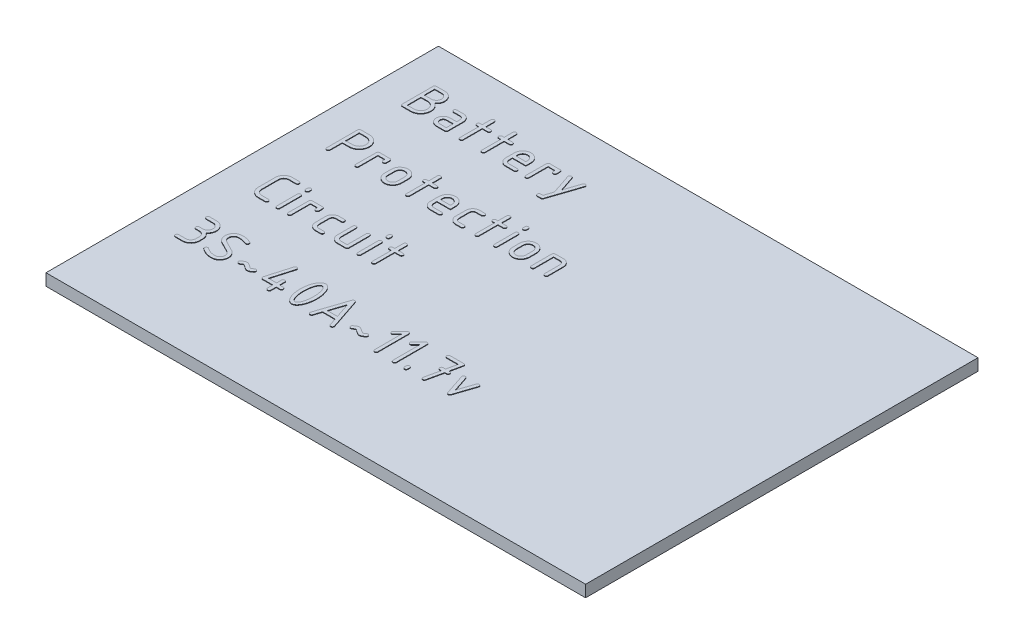
from build123d import *

# Parameters (mm, degrees)
SKETCH1_W       = 55
SKETCH1_H       = 40
BOSS_PCB_DEPTH  = 1.2
BOSS_TEXT_DEPTH = 0.05


with BuildPart() as part:
    # Sketch1 → boss-PCB (new body)
    with BuildSketch(Plane(origin=(0, 0, 0), x_dir=(1, 0, 0), z_dir=(0, 1, 0))):
        Rectangle(SKETCH1_W, SKETCH1_H)
    extrude(amount=BOSS_PCB_DEPTH)

    # Sketch2 → boss-Text (add)
    # profile 1 of 39: a face of its own
    with BuildSketch(Plane(origin=(0, 1.2, 0), x_dir=(1, 0, 0), z_dir=(0, 1, 0))):
        with BuildLine():
            add(Edge.make_bspline(
                [(-22.605308535, 14.737756089), (-22.580505605, 14.758140724), (-22.530776702, 14.799011117), (-22.46622678, 14.870838657), (-22.407399618, 14.947961859), (-22.358852228, 15.032497307), (-22.319190331, 15.12252615), (-22.291122674, 15.217442549), (-22.272405263, 15.316411516), (-22.269899063, 15.383918545), (-22.268628193, 15.418150704)],
                knots=[0, 0, 0, 0, 0.979311273, 1.96348063, 2.941259643, 3.937560404, 4.933308154, 5.939224348, 6.955000665, 8, 8, 8, 8], degree=3))
            add(Edge.make_bspline(
                [(-22.268628193, 15.418150704), (-22.269922068, 15.448795919), (-22.272471771, 15.509185204), (-22.286653105, 15.597653265), (-22.306636177, 15.682439612), (-22.335683112, 15.762774494), (-22.371370969, 15.839213468), (-22.413997039, 15.912220367), (-22.464919183, 15.980577697), (-22.522320743, 16.044405575), (-22.58534897, 16.102332647), (-22.652252306, 16.153887521), (-22.723171021, 16.197786363), (-22.798291294, 16.233204241), (-22.877081215, 16.261933843), (-22.959714942, 16.283205409), (-23.046197404, 16.297066096), (-23.10516222, 16.29965953), (-23.135091608, 16.300975907)],
                knots=[0, 0, 0, 0, 1.071129595, 2.110761866, 3.125825712, 4.111435262, 5.090227048, 6.070946592, 7.060485452, 8.063946632, 9.066860109, 10.048139744, 11.011833944, 11.97563504, 12.945651408, 13.938619982, 14.953683829, 16, 16, 16, 16], degree=3))
            Line((-23.135091608, 16.300975907), (-24.00084364, 16.301569189))
            add(Edge.make_bspline(
                [(-24.00084364, 16.301569189), (-24.013011707, 16.300633485), (-24.036804585, 16.298803852), (-24.070577048, 16.288549144), (-24.101386405, 16.272838805), (-24.127333189, 16.250333793), (-24.149850897, 16.224384895), (-24.165512853, 16.193571295), (-24.175950516, 16.15983888), (-24.177292202, 16.136015304), (-24.177977786, 16.123841761)],
                knots=[0, 0, 0, 0, 1.047537158, 2.048305948, 3.015858061, 4.000898756, 4.985939451, 5.953491565, 6.954260354, 8, 8, 8, 8], degree=3))
            Line((-24.177977786, 16.123841761), (-24.177861075, 12.985557335))
            add(Edge.make_bspline(
                [(-24.177861075, 12.985557335), (-24.177234353, 12.973270294), (-24.176013091, 12.949327172), (-24.165505091, 12.915495175), (-24.149853061, 12.884679841), (-24.127332329, 12.858734668), (-24.101387651, 12.836216527), (-24.070572934, 12.820554686), (-24.036840823, 12.810116992), (-24.013017205, 12.80877531), (-24.00084364, 12.808089728)],
                knots=[0, 0, 0, 0, 1.05396616, 2.05380953, 3.02046694, 4.004596759, 4.988726579, 5.955383988, 6.955227358, 8, 8, 8, 8], degree=3))
            Line((-24.00084364, 12.808089728), (-23.134780378, 12.808089728))
            add(Edge.make_bspline(
                [(-23.134780378, 12.808089728), (-23.099245318, 12.809745422), (-23.02937441, 12.813000935), (-22.927178813, 12.830099689), (-22.829061462, 12.854522942), (-22.735823794, 12.889359805), (-22.645967528, 12.93076847), (-22.561939583, 12.983580561), (-22.481902466, 13.044237436), (-22.406835594, 13.113008543), (-22.338282284, 13.188360281), (-22.27830615, 13.269317989), (-22.226385177, 13.354251987), (-22.184803723, 13.444255108), (-22.150676404, 13.538398372), (-22.126375277, 13.637152977), (-22.109184754, 13.740384809), (-22.105947527, 13.810831614), (-22.104298925, 13.846707614)],
                knots=[0, 0, 0, 0, 1.051891916, 2.068285354, 3.060554884, 4.039609718, 5.009594003, 5.983302629, 6.969973172, 7.97826734, 8.991749582, 9.979816616, 10.955848891, 11.932183842, 12.908846588, 13.91472029, 14.938042748, 16, 16, 16, 16], degree=3))
            add(Edge.make_bspline(
                [(-22.104298925, 13.846707614), (-22.106106282, 13.893082771), (-22.109676538, 13.984692275), (-22.137071313, 14.118003994), (-22.179003975, 14.245270809), (-22.238496091, 14.364045844), (-22.310738528, 14.474920263), (-22.397243287, 14.574185924), (-22.494770811, 14.66380048), (-22.568587258, 14.712694076), (-22.605308535, 14.737756089)],
                knots=[0, 0, 0, 0, 1.041522939, 2.057424851, 3.046683826, 4.045315268, 5.034172222, 6.012808904, 6.997578941, 8, 8, 8, 8], degree=3))
        make_face()
        with BuildLine():
            add(Edge.make_bspline(
                [(-23.140879924, 15.962703986), (-23.105313095, 15.96010281), (-23.03562145, 15.955005921), (-22.936078242, 15.925206362), (-22.845883262, 15.877306914), (-22.767345401, 15.812296162), (-22.701219419, 15.734218198), (-22.652992957, 15.643795344), (-22.622939318, 15.543040225), (-22.617751887, 15.472425443), (-22.615071282, 15.435935257)],
                knots=[0, 0, 0, 0, 1.033778198, 2.025643168, 2.993454797, 3.982372096, 4.970376955, 5.947511811, 6.939376781, 8, 8, 8, 8], degree=3))
            add(Edge.make_bspline(
                [(-22.615071282, 15.435935257), (-22.61779598, 15.400164506), (-22.623101763, 15.330508399), (-22.652939399, 15.230848813), (-22.701634536, 15.141019096), (-22.767261374, 15.062411111), (-22.845869596, 14.996801515), (-22.935882419, 14.947929173), (-23.035863996, 14.918356333), (-23.105731382, 14.912977242), (-23.141494047, 14.910223875)],
                knots=[0, 0, 0, 0, 1.041902478, 2.028888707, 3.001655466, 3.996692973, 4.99173048, 5.964497239, 6.958097522, 8, 8, 8, 8], degree=3))
            Line((-23.141494047, 14.910223875), (-23.844032514, 14.910433677))
            Line((-23.844032514, 14.910433677), (-23.844032514, 15.962703986))
            Line((-23.844032514, 15.962703986), (-23.140879924, 15.962703986))
        make_face(mode=Mode.SUBTRACT)
        with BuildLine():
            add(Edge.make_bspline(
                [(-23.140879924, 14.556398806), (-23.117329288, 14.553718237), (-23.070716995, 14.548412756), (-23.00225355, 14.535079267), (-22.936890322, 14.515730456), (-22.874007658, 14.491545032), (-22.814714568, 14.460793525), (-22.757903389, 14.42534208), (-22.705341229, 14.383208171), (-22.654549896, 14.337871199), (-22.610029024, 14.286349093), (-22.568335889, 14.233497312), (-22.535479748, 14.175618082), (-22.506334841, 14.116092352), (-22.484692848, 14.052598177), (-22.467083857, 13.986918672), (-22.457505686, 13.917625727), (-22.454912023, 13.870680606), (-22.453587542, 13.846707614)],
                knots=[0, 0, 0, 0, 1.04564758, 2.069584492, 3.072783481, 4.050113353, 5.0374731, 6.015698681, 6.999448324, 8.006622551, 9.014557359, 10.000197014, 10.971008284, 11.944465972, 12.920675053, 13.925618547, 14.940696546, 16, 16, 16, 16], degree=3))
            add(Edge.make_bspline(
                [(-22.453587542, 13.846707614), (-22.454911544, 13.822971416), (-22.457503829, 13.776497926), (-22.467085989, 13.707911917), (-22.484688816, 13.642939907), (-22.506350954, 13.580162077), (-22.535447586, 13.521312343), (-22.56858743, 13.464113859), (-22.609750335, 13.411323133), (-22.654873386, 13.360597238), (-22.704872044, 13.315071706), (-22.758042649, 13.274568374), (-22.814552125, 13.240223686), (-22.874295664, 13.21207392), (-22.936703684, 13.188658161), (-23.002432733, 13.172762097), (-23.070959327, 13.161733985), (-23.117739194, 13.15931705), (-23.141494047, 13.158089728)],
                knots=[0, 0, 0, 0, 1.057270466, 2.070047137, 3.072834594, 4.046924837, 5.018671246, 5.988182896, 6.981720685, 7.989873786, 9.005118707, 9.98387978, 10.958826115, 11.940084321, 12.917765115, 13.917942371, 14.942729534, 16, 16, 16, 16], degree=3))
            Line((-23.141494047, 13.158089728), (-23.823826205, 13.158089728))
            Line((-23.823826205, 13.158089728), (-23.823826205, 14.536152899))
            Line((-23.823826205, 14.536152899), (-23.140879924, 14.556398806))
        make_face(mode=Mode.SUBTRACT)
    # profile 2 of 39: a face of its own
    with BuildSketch(Plane(origin=(0, 1.2, 0), x_dir=(1, 0, 0), z_dir=(0, 1, 0))):
        with BuildLine():
            add(Edge.make_bspline(
                [(-19.675641083, 12.808089728), (-19.663707286, 12.808795603), (-19.640126943, 12.810190363), (-19.60662259, 12.820553888), (-19.575807866, 12.836216754), (-19.549862529, 12.858734564), (-19.527344432, 12.884680027), (-19.511682579, 12.915494536), (-19.501244888, 12.949226703), (-19.499903206, 12.973050314), (-19.499217624, 12.985223875)],
                knots=[0, 0, 0, 0, 1.028290674, 2.031829889, 3.002060474, 3.989828055, 4.977595636, 5.947826221, 6.951365436, 8, 8, 8, 8], degree=3))
            Line((-19.499217624, 12.985223875), (-19.498623648, 14.552383388))
            add(Edge.make_bspline(
                [(-19.498623648, 14.552383388), (-19.500146316, 14.576365856), (-19.503158839, 14.623813971), (-19.513437063, 14.69351751), (-19.53107805, 14.759940149), (-19.552818702, 14.823811798), (-19.581272581, 14.884525166), (-19.616729142, 14.941371104), (-19.65654712, 14.996155605), (-19.702745288, 15.046719209), (-19.752647421, 15.093492751), (-19.80620763, 15.134404736), (-19.863086815, 15.168455261), (-19.922179744, 15.198246371), (-19.984834528, 15.220754104), (-20.050386239, 15.237171973), (-20.118499802, 15.247968212), (-20.165033413, 15.250438866), (-20.188546892, 15.251687289)],
                knots=[0, 0, 0, 0, 1.059619813, 2.096404878, 3.100829273, 4.086403753, 5.068810694, 6.049880874, 7.037118397, 8.051510359, 9.06525525, 10.050385777, 11.017082171, 11.985191658, 12.964420813, 13.945992491, 14.962107962, 16, 16, 16, 16], degree=3))
            Line((-20.188546892, 15.251687289), (-20.864476611, 15.252397977))
            add(Edge.make_bspline(
                [(-20.864476611, 15.252397977), (-20.87682284, 15.251369611), (-20.900478933, 15.249399204), (-20.934467896, 15.240094436), (-20.964406905, 15.224078487), (-20.991075387, 15.203319391), (-21.013310403, 15.177922715), (-21.028874985, 15.148067961), (-21.039640823, 15.115110454), (-21.040859307, 15.091718362), (-21.041494047, 15.079532818)],
                knots=[0, 0, 0, 0, 1.079206993, 2.06782338, 3.048402984, 4.020659448, 5.003199996, 5.965507013, 6.940180116, 8, 8, 8, 8], degree=3))
            add(Edge.make_bspline(
                [(-21.041494047, 15.079532818), (-21.040808469, 15.067359252), (-21.039466798, 15.043535631), (-21.029029032, 15.009803537), (-21.013367453, 14.978988762), (-20.990848322, 14.953044302), (-20.964906839, 14.930522755), (-20.934281792, 14.914977286), (-20.900821875, 14.904495747), (-20.877246458, 14.902643734), (-20.865071282, 14.901687289)],
                knots=[0, 0, 0, 0, 1.04824888, 2.051418997, 3.021292735, 4.008697018, 4.996101301, 5.965975039, 6.94955792, 8, 8, 8, 8], degree=3))
            Line((-20.865071282, 14.901687289), (-20.188345426, 14.902397282))
            add(Edge.make_bspline(
                [(-20.188345426, 14.902397282), (-20.165761191, 14.900325245), (-20.121402851, 14.896255498), (-20.057786234, 14.876962482), (-20.000239698, 14.844747577), (-19.950070939, 14.8011632), (-19.908024082, 14.749086561), (-19.877645451, 14.688908987), (-19.857800308, 14.622610672), (-19.854481817, 14.57578034), (-19.852774534, 14.551687289)],
                knots=[0, 0, 0, 0, 1.01056548, 1.984880443, 2.942025514, 3.932817291, 4.934573529, 5.909750539, 6.924618165, 8, 8, 8, 8], degree=3))
            Line((-19.852774534, 14.551687289), (-19.852658518, 14.20726094))
            Line((-19.852658518, 14.20726094), (-20.528775114, 14.20726094))
            add(Edge.make_bspline(
                [(-20.528775114, 14.20726094), (-20.552466315, 14.20580397), (-20.598699174, 14.202960726), (-20.666465869, 14.191968094), (-20.731444311, 14.175957935), (-20.793469294, 14.152820538), (-20.853066356, 14.124479853), (-20.909354601, 14.089009579), (-20.963507318, 14.048751067), (-21.013929481, 14.002417796), (-21.059774606, 13.95158851), (-21.100482634, 13.897303694), (-21.135879279, 13.840204211), (-21.164126813, 13.779357849), (-21.186988542, 13.715788801), (-21.204303324, 13.649183258), (-21.214897759, 13.579307588), (-21.217372025, 13.531599451), (-21.218628193, 13.507378346)],
                knots=[0, 0, 0, 0, 1.046267527, 2.041768074, 3.02338354, 3.992834498, 4.956401025, 5.928612111, 6.922133093, 7.928831975, 8.943269188, 9.93679017, 10.917904115, 11.90035488, 12.889462644, 13.893931846, 14.930763161, 16, 16, 16, 16], degree=3))
            add(Edge.make_bspline(
                [(-21.218628193, 13.507378346), (-21.217395762, 13.48315259), (-21.214980165, 13.435669488), (-21.204083527, 13.365861606), (-21.187276524, 13.299352355), (-21.163938976, 13.235939743), (-21.135906475, 13.175253099), (-21.100467427, 13.118175329), (-21.059808693, 13.063845885), (-21.013698153, 13.013057027), (-20.963719361, 12.966038105), (-20.909571981, 12.925600259), (-20.852656891, 12.891267279), (-20.7936965, 12.861720001), (-20.731409803, 12.83885816), (-20.666472607, 12.822807471), (-20.598894328, 12.811685714), (-20.55281793, 12.809304952), (-20.529298925, 12.808089728)],
                knots=[0, 0, 0, 0, 1.070050417, 2.097326286, 3.112697215, 4.092715178, 5.075913486, 6.057773957, 7.052050906, 8.067260001, 9.081821504, 10.076098452, 11.043573558, 12.012462896, 12.982651505, 13.965013879, 14.961271899, 16, 16, 16, 16], degree=3))
            Line((-20.529298925, 12.808089728), (-19.675641083, 12.808089728))
        make_face()
        with BuildLine():
            Line((-19.852658518, 13.158089728), (-20.528775114, 13.158089728))
            add(Edge.make_bspline(
                [(-20.528775114, 13.158089728), (-20.551628783, 13.159779635), (-20.596382991, 13.163088969), (-20.660108074, 13.183650658), (-20.717675444, 13.216449683), (-20.767563142, 13.260748187), (-20.809863659, 13.312789056), (-20.840040629, 13.372821739), (-20.859923026, 13.438108786), (-20.863333496, 13.483996511), (-20.865071282, 13.507378346)],
                knots=[0, 0, 0, 0, 1.022182729, 2.001734515, 2.966121865, 3.9659665, 4.969854105, 5.94710593, 6.953959235, 8, 8, 8, 8], degree=3))
            add(Edge.make_bspline(
                [(-20.865071282, 13.507378346), (-20.863373191, 13.531003753), (-20.860073266, 13.57691533), (-20.840043411, 13.641970576), (-20.809803056, 13.701248811), (-20.767762417, 13.752642535), (-20.717399807, 13.795494346), (-20.659944147, 13.827461487), (-20.596563373, 13.848085226), (-20.551980307, 13.851415696), (-20.529298925, 13.853110053)],
                knots=[0, 0, 0, 0, 1.062440908, 2.064655985, 3.037845215, 4.038981328, 5.030468673, 5.99496854, 6.979951617, 8, 8, 8, 8], degree=3))
            Line((-20.529298925, 13.853110053), (-19.852658518, 13.85322607))
            Line((-19.852658518, 13.85322607), (-19.852658518, 13.158089728))
        make_face(mode=Mode.SUBTRACT)
    # profile 3 of 39: a face of its own
    with BuildSketch(Plane(origin=(0, 1.2, 0), x_dir=(1, 0, 0), z_dir=(0, 1, 0))):
        with BuildLine():
            add(Edge.make_bspline(
                [(-18.289560969, 12.977993342), (-18.288751684, 12.96561423), (-18.287195998, 12.94181788), (-18.276557444, 12.908190586), (-18.261038449, 12.877561466), (-18.238508321, 12.851625855), (-18.212571365, 12.829087404), (-18.181939318, 12.81359996), (-18.14852812, 12.802903739), (-18.124915795, 12.801632009), (-18.112733884, 12.800975907)],
                knots=[0, 0, 0, 0, 1.066925146, 2.050948606, 3.021256784, 4.009103359, 4.996949935, 5.967258112, 6.951281573, 8, 8, 8, 8], degree=3))
            add(Edge.make_bspline(
                [(-18.112733884, 12.800975907), (-18.100548319, 12.801610645), (-18.077156187, 12.802829124), (-18.044198957, 12.813594992), (-18.014343176, 12.829159462), (-17.988950398, 12.851394903), (-17.96817679, 12.878061806), (-17.95221547, 12.908006759), (-17.942759048, 12.941756618), (-17.941322601, 12.965245826), (-17.940579412, 12.977398671)],
                knots=[0, 0, 0, 0, 1.062394479, 2.039435332, 3.004080058, 3.989007468, 4.963625811, 5.946587513, 6.937605521, 8, 8, 8, 8], degree=3))
            Line((-17.940579412, 12.977398671), (-17.940443249, 14.910433677))
            Line((-17.940443249, 14.910433677), (-17.409390944, 14.910433677))
            add(Edge.make_bspline(
                [(-17.409390944, 14.910433677), (-17.39836719, 14.910348185), (-17.376783044, 14.910180794), (-17.34573707, 14.918234035), (-17.317478266, 14.933079922), (-17.293301706, 14.954471121), (-17.272087526, 14.980070016), (-17.257402956, 15.010376572), (-17.247673934, 15.043855078), (-17.246280185, 15.067367804), (-17.245559087, 15.079532818)],
                knots=[0, 0, 0, 0, 0.996423614, 1.950964461, 2.874475015, 3.865856656, 4.86003355, 5.869904087, 6.897931053, 8, 8, 8, 8], degree=3))
            add(Edge.make_bspline(
                [(-17.245559087, 15.079532818), (-17.246282952, 15.091687999), (-17.247668466, 15.114953649), (-17.257194085, 15.14825651), (-17.273217766, 15.177418588), (-17.293708347, 15.203538029), (-17.319827789, 15.224028611), (-17.348989867, 15.240052292), (-17.382292728, 15.24957791), (-17.405558378, 15.250963425), (-17.417713559, 15.251687289)],
                knots=[0, 0, 0, 0, 1.074072426, 2.055830582, 3.03107878, 4, 4.96892122, 5.944169418, 6.925927574, 8, 8, 8, 8], degree=3))
            Line((-17.417713559, 15.251687289), (-17.915896398, 15.252397977))
            Line((-17.915896398, 15.252397977), (-17.915896398, 16.127718237))
            add(Edge.make_bspline(
                [(-17.915896398, 16.127718237), (-17.916849359, 16.139763701), (-17.918697788, 16.1631279), (-17.927998804, 16.196431284), (-17.943341883, 16.22636892), (-17.964075015, 16.252412691), (-17.988766523, 16.275151148), (-18.018623415, 16.290453189), (-18.051309972, 16.301191708), (-18.074464378, 16.302457082), (-18.086412746, 16.303110053)],
                knots=[0, 0, 0, 0, 1.064216918, 2.064227333, 3.02791014, 4.011372081, 4.98947938, 5.962877205, 6.948783637, 8, 8, 8, 8], degree=3))
            add(Edge.make_bspline(
                [(-18.086412746, 16.303110053), (-18.101194777, 16.30249517), (-18.129234092, 16.301328828), (-18.168569521, 16.290722646), (-18.203436551, 16.275595344), (-18.232065347, 16.252965848), (-18.254854379, 16.226411444), (-18.272744996, 16.196892739), (-18.282828576, 16.163120644), (-18.284187347, 16.139555989), (-18.284888356, 16.127398671)],
                knots=[0, 0, 0, 0, 1.192885545, 2.262726465, 3.275344821, 4.245864175, 5.184010886, 6.09510909, 7.017241583, 8, 8, 8, 8], degree=3))
            Line((-18.284888356, 16.127398671), (-18.284661186, 15.252397977))
            Line((-18.284661186, 15.252397977), (-18.455151134, 15.252397977))
            add(Edge.make_bspline(
                [(-18.455151134, 15.252397977), (-18.470048893, 15.251364971), (-18.49832253, 15.249404486), (-18.538476762, 15.240508086), (-18.572985115, 15.22443963), (-18.602771466, 15.203827443), (-18.62646541, 15.177959671), (-18.643669822, 15.148326075), (-18.655227659, 15.115211366), (-18.656355503, 15.091727928), (-18.656941201, 15.079532818)],
                knots=[0, 0, 0, 0, 1.206129973, 2.289047797, 3.300800633, 4.2630787, 5.198855423, 6.10917488, 7.01808158, 8, 8, 8, 8], degree=3))
            add(Edge.make_bspline(
                [(-18.656941201, 15.079532818), (-18.656255616, 15.067359278), (-18.654913929, 15.043535709), (-18.644476272, 15.009803244), (-18.628814295, 14.978989828), (-18.606296668, 14.953040234), (-18.580349582, 14.930537815), (-18.549541345, 14.914817859), (-18.515760139, 14.904599357), (-18.491973927, 14.902672761), (-18.479807055, 14.901687289)],
                knots=[0, 0, 0, 0, 1.045688611, 2.046408561, 3.013913455, 3.998906078, 4.983898701, 5.951403595, 6.952123545, 8, 8, 8, 8], degree=3))
            Line((-18.479807055, 14.901687289), (-18.284661186, 14.902397282))
            Line((-18.284661186, 14.902397282), (-18.289560969, 12.977993342))
        make_face()
    # profile 4 of 39: a face of its own
    with BuildSketch(Plane(origin=(0, 1.2, 0), x_dir=(1, 0, 0), z_dir=(0, 1, 0))):
        with BuildLine():
            add(Edge.make_bspline(
                [(-16.05866666, 12.977993342), (-16.057857375, 12.96561423), (-16.056301689, 12.94181788), (-16.045663135, 12.908190586), (-16.03014414, 12.877561466), (-16.007614012, 12.851625855), (-15.981677056, 12.829087404), (-15.951045009, 12.81359996), (-15.917633811, 12.802903739), (-15.894021486, 12.801632009), (-15.881839575, 12.800975907)],
                knots=[0, 0, 0, 0, 1.066925146, 2.050948606, 3.021256784, 4.009103359, 4.996949935, 5.967258112, 6.951281573, 8, 8, 8, 8], degree=3))
            add(Edge.make_bspline(
                [(-15.881839575, 12.800975907), (-15.86965401, 12.801610645), (-15.846261878, 12.802829124), (-15.813304648, 12.813594992), (-15.783448867, 12.829159462), (-15.75805609, 12.851394903), (-15.737282481, 12.878061806), (-15.721321161, 12.908006759), (-15.711864739, 12.941756618), (-15.710428292, 12.965245826), (-15.709685103, 12.977398671)],
                knots=[0, 0, 0, 0, 1.062394479, 2.039435332, 3.004080058, 3.989007468, 4.963625811, 5.946587513, 6.937605521, 8, 8, 8, 8], degree=3))
            Line((-15.709685103, 12.977398671), (-15.70954894, 14.910433677))
            Line((-15.70954894, 14.910433677), (-15.178496635, 14.910433677))
            add(Edge.make_bspline(
                [(-15.178496635, 14.910433677), (-15.167472881, 14.910348185), (-15.145888735, 14.910180794), (-15.114842761, 14.918234035), (-15.086583957, 14.933079922), (-15.062407397, 14.954471121), (-15.041193218, 14.980070016), (-15.026508647, 15.010376572), (-15.016779625, 15.043855078), (-15.015385876, 15.067367804), (-15.014664778, 15.079532818)],
                knots=[0, 0, 0, 0, 0.996423614, 1.950964461, 2.874475015, 3.865856656, 4.86003355, 5.869904087, 6.897931053, 8, 8, 8, 8], degree=3))
            add(Edge.make_bspline(
                [(-15.014664778, 15.079532818), (-15.015388643, 15.091687999), (-15.016774157, 15.114953649), (-15.026299776, 15.14825651), (-15.042323457, 15.177418588), (-15.062814038, 15.203538029), (-15.08893348, 15.224028611), (-15.118095558, 15.240052292), (-15.151398419, 15.24957791), (-15.174664069, 15.250963425), (-15.18681925, 15.251687289)],
                knots=[0, 0, 0, 0, 1.074072426, 2.055830582, 3.03107878, 4, 4.96892122, 5.944169418, 6.925927574, 8, 8, 8, 8], degree=3))
            Line((-15.18681925, 15.251687289), (-15.685002089, 15.252397977))
            Line((-15.685002089, 15.252397977), (-15.685002089, 16.127718237))
            add(Edge.make_bspline(
                [(-15.685002089, 16.127718237), (-15.685955051, 16.139763701), (-15.687803479, 16.1631279), (-15.697104495, 16.196431284), (-15.712447574, 16.22636892), (-15.733180706, 16.252412691), (-15.757872214, 16.275151148), (-15.787729106, 16.290453189), (-15.820415663, 16.301191708), (-15.84357007, 16.302457082), (-15.855518437, 16.303110053)],
                knots=[0, 0, 0, 0, 1.064216918, 2.064227333, 3.02791014, 4.011372081, 4.98947938, 5.962877205, 6.948783637, 8, 8, 8, 8], degree=3))
            add(Edge.make_bspline(
                [(-15.855518437, 16.303110053), (-15.870300468, 16.30249517), (-15.898339783, 16.301328828), (-15.937675212, 16.290722646), (-15.972542242, 16.275595344), (-16.001171038, 16.252965848), (-16.023960071, 16.226411444), (-16.041850687, 16.196892739), (-16.051934267, 16.163120644), (-16.053293039, 16.139555989), (-16.053994047, 16.127398671)],
                knots=[0, 0, 0, 0, 1.192885545, 2.262726465, 3.275344821, 4.245864175, 5.184010886, 6.09510909, 7.017241583, 8, 8, 8, 8], degree=3))
            Line((-16.053994047, 16.127398671), (-16.053766877, 15.252397977))
            Line((-16.053766877, 15.252397977), (-16.224256825, 15.252397977))
            add(Edge.make_bspline(
                [(-16.224256825, 15.252397977), (-16.239154584, 15.251364971), (-16.267428221, 15.249404486), (-16.307582453, 15.240508086), (-16.342090806, 15.22443963), (-16.371877157, 15.203827443), (-16.395571101, 15.177959671), (-16.412775513, 15.148326075), (-16.42433335, 15.115211366), (-16.425461195, 15.091727928), (-16.426046892, 15.079532818)],
                knots=[0, 0, 0, 0, 1.206129973, 2.289047797, 3.300800633, 4.2630787, 5.198855423, 6.10917488, 7.01808158, 8, 8, 8, 8], degree=3))
            add(Edge.make_bspline(
                [(-16.426046892, 15.079532818), (-16.425361307, 15.067359278), (-16.42401962, 15.043535709), (-16.413581963, 15.009803244), (-16.397919986, 14.978989828), (-16.375402359, 14.953040234), (-16.349455273, 14.930537815), (-16.318647036, 14.914817859), (-16.28486583, 14.904599357), (-16.261079618, 14.902672761), (-16.248912746, 14.901687289)],
                knots=[0, 0, 0, 0, 1.045688611, 2.046408561, 3.013913455, 3.998906078, 4.983898701, 5.951403595, 6.952123545, 8, 8, 8, 8], degree=3))
            Line((-16.248912746, 14.901687289), (-16.053766877, 14.902397282))
            Line((-16.053766877, 14.902397282), (-16.05866666, 12.977993342))
        make_face()
    # profile 5 of 39: a face of its own
    with BuildSketch(Plane(origin=(0, 1.2, 0), x_dir=(1, 0, 0), z_dir=(0, 1, 0))):
        with BuildLine():
            Line((-12.441713078, 13.85322607), (-12.441713078, 14.382252604))
            add(Edge.make_bspline(
                [(-12.441713078, 14.382252604), (-12.443576522, 14.411980331), (-12.447257701, 14.470706606), (-12.460845736, 14.556962939), (-12.481525814, 14.6398078), (-12.509005011, 14.71916987), (-12.545079663, 14.794243489), (-12.587972994, 14.865661885), (-12.637778882, 14.933711304), (-12.695567814, 14.996535371), (-12.758041162, 15.054241934), (-12.824562722, 15.105662767), (-12.895715493, 15.147960726), (-12.969421862, 15.185076646), (-13.047903006, 15.212230149), (-13.129070435, 15.23402109), (-13.214188284, 15.247751949), (-13.272204201, 15.250362177), (-13.301656648, 15.251687289)],
                knots=[0, 0, 0, 0, 1.054838454, 2.083803214, 3.088299601, 4.076682774, 5.05368276, 6.033387873, 7.02472991, 8.035704388, 9.052352383, 10.035293822, 11.007804826, 11.980896217, 12.953443506, 13.943752728, 14.956122424, 16, 16, 16, 16], degree=3))
            add(Edge.make_bspline(
                [(-13.301656648, 15.251687289), (-13.330869157, 15.250344353), (-13.388641804, 15.247688471), (-13.473327237, 15.234139305), (-13.554176536, 15.212069415), (-13.632318748, 15.185263558), (-13.705622361, 15.147782784), (-13.776697313, 15.105467321), (-13.843793469, 15.054480953), (-13.906329806, 14.996529728), (-13.964097353, 14.933519574), (-14.014575622, 14.865677293), (-14.058386356, 14.794457701), (-14.09407114, 14.718993914), (-14.122733676, 14.639974718), (-14.143070671, 14.556935399), (-14.156972972, 14.470546978), (-14.16011989, 14.411596783), (-14.161717624, 14.381666964)],
                knots=[0, 0, 0, 0, 1.035417041, 2.047711257, 3.029825278, 4.002300055, 4.96778376, 5.940222256, 6.929780436, 7.946352632, 8.957251735, 9.953525848, 10.937506188, 11.914433331, 12.905559073, 13.909980568, 14.93886861, 16, 16, 16, 16], degree=3))
            Line((-14.161717624, 14.381666964), (-14.161600913, 13.508073055))
            add(Edge.make_bspline(
                [(-14.161600913, 13.508073055), (-14.160428209, 13.483614188), (-14.158140189, 13.435893353), (-14.14716381, 13.365862186), (-14.130368299, 13.299352206), (-14.107027786, 13.235939782), (-14.078996072, 13.175253088), (-14.043556813, 13.118175332), (-14.002898136, 13.063845884), (-13.956787581, 13.013057027), (-13.906808793, 12.966038105), (-13.852661411, 12.925600259), (-13.795746322, 12.891267279), (-13.736785931, 12.861720001), (-13.674499234, 12.83885816), (-13.609562038, 12.822807471), (-13.541983759, 12.811685714), (-13.495907361, 12.809304952), (-13.472388356, 12.808089728)],
                knots=[0, 0, 0, 0, 1.079452155, 2.106081125, 3.120812651, 4.100213474, 5.082792639, 6.06403481, 7.057685639, 8.072255433, 9.086178042, 10.079828871, 11.046694736, 12.014973941, 12.9845516, 13.966295357, 14.961926011, 16, 16, 16, 16], degree=3))
            Line((-13.472388356, 12.808089728), (-12.618730514, 12.808089728))
            add(Edge.make_bspline(
                [(-12.618730514, 12.808089728), (-12.606796716, 12.808795603), (-12.583216374, 12.810190363), (-12.549712021, 12.820553888), (-12.518897297, 12.836216754), (-12.49295196, 12.858734564), (-12.470433863, 12.884680027), (-12.45477201, 12.915494536), (-12.444334319, 12.949226703), (-12.442992637, 12.973050314), (-12.442307055, 12.985223875)],
                knots=[0, 0, 0, 0, 1.028290674, 2.031829889, 3.002060474, 3.989828055, 4.977595636, 5.947826221, 6.951365436, 8, 8, 8, 8], degree=3))
            add(Edge.make_bspline(
                [(-12.442307055, 12.985223875), (-12.442940688, 12.99741101), (-12.444157048, 13.020806156), (-12.454937772, 13.053742256), (-12.470447103, 13.083676461), (-12.492990849, 13.108882744), (-12.518931894, 13.130766846), (-12.549896907, 13.145482466), (-12.583422338, 13.156109208), (-12.607260305, 13.157419954), (-12.619441201, 13.158089728)],
                knots=[0, 0, 0, 0, 1.058535215, 2.032026861, 2.993167411, 3.974516965, 4.958471876, 5.928450685, 6.941464785, 8, 8, 8, 8], degree=3))
            Line((-12.619441201, 13.158089728), (-13.471864545, 13.158089728))
            add(Edge.make_bspline(
                [(-13.471864545, 13.158089728), (-13.494718214, 13.159779635), (-13.539472422, 13.163088969), (-13.603197504, 13.183650658), (-13.660764875, 13.216449683), (-13.710652573, 13.260748187), (-13.75295309, 13.312789056), (-13.78313006, 13.372821739), (-13.803012457, 13.438108786), (-13.806422927, 13.483996511), (-13.808160713, 13.507378346)],
                knots=[0, 0, 0, 0, 1.022182729, 2.001734515, 2.966121865, 3.9659665, 4.969854105, 5.94710593, 6.953959235, 8, 8, 8, 8], degree=3))
            Line((-13.808160713, 13.507378346), (-13.807566042, 13.85322607))
            Line((-13.807566042, 13.85322607), (-12.441713078, 13.85322607))
        make_face()
        with BuildLine():
            add(Edge.make_bspline(
                [(-13.301649701, 14.902397282), (-13.266813305, 14.899693591), (-13.198989345, 14.8944297), (-13.102372269, 14.864334107), (-13.015220309, 14.816750305), (-12.940143925, 14.751249738), (-12.877350122, 14.673792823), (-12.831861736, 14.584575629), (-12.802204932, 14.486418436), (-12.798015906, 14.417216584), (-12.795863965, 14.381666964)],
                knots=[0, 0, 0, 0, 1.038247234, 2.021392714, 2.988830595, 3.975699596, 4.970801565, 5.940737858, 6.94213832, 8, 8, 8, 8], degree=3))
            Line((-12.795863965, 14.381666964), (-12.795747949, 14.20726094))
            Line((-12.795747949, 14.20726094), (-13.807566042, 14.20726094))
            Line((-13.807566042, 14.20726094), (-13.807566042, 14.382252604))
            add(Edge.make_bspline(
                [(-13.807566042, 14.382252604), (-13.805310891, 14.417583456), (-13.800909452, 14.486539633), (-13.771809263, 14.585012358), (-13.72421854, 14.67335737), (-13.661865589, 14.751593881), (-13.586083492, 14.816302968), (-13.49960195, 14.864349193), (-13.403654104, 14.894584459), (-13.336261427, 14.899277505), (-13.301649701, 14.902397282)],
                knots=[0, 0, 0, 0, 1.054091962, 2.057299688, 3.035561359, 4.032459226, 5.026489474, 5.989478573, 6.96763785, 8, 8, 8, 8], degree=3))
        make_face(mode=Mode.SUBTRACT)
    # profile 6 of 39: a face of its own
    with BuildSketch(Plane(origin=(0, 1.2, 0), x_dir=(1, 0, 0), z_dir=(0, 1, 0))):
        with BuildLine():
            add(Edge.make_bspline(
                [(-11.58668527, 12.977993342), (-11.585974703, 12.965612082), (-11.584608352, 12.941804146), (-11.573900632, 12.90819211), (-11.558400122, 12.877561052), (-11.535864978, 12.851625967), (-11.509929369, 12.829087374), (-11.479296967, 12.813599968), (-11.445885864, 12.802903736), (-11.422273525, 12.801632008), (-11.410091608, 12.800975907)],
                knots=[0, 0, 0, 0, 1.066321637, 2.050430755, 3.020823396, 4.008755961, 4.996688526, 5.967081167, 6.951190285, 8, 8, 8, 8], degree=3))
            add(Edge.make_bspline(
                [(-11.410091608, 12.800975907), (-11.397909706, 12.80163201), (-11.3742974, 12.802903742), (-11.340886067, 12.813599949), (-11.310254521, 12.829087445), (-11.284315665, 12.851625698), (-11.261792615, 12.877562047), (-11.246247542, 12.908188448), (-11.235765896, 12.941648001), (-11.233913898, 12.96522347), (-11.232957461, 12.977398671)],
                knots=[0, 0, 0, 0, 1.050821717, 2.036818717, 3.009072926, 3.998900708, 4.98872849, 5.9609827, 6.9469797, 8, 8, 8, 8], degree=3))
            Line((-11.232957461, 12.977398671), (-11.2326504, 14.910433677))
            Line((-11.2326504, 14.910433677), (-10.52949781, 14.910433677))
            Line((-10.52949781, 14.910433677), (-10.52949781, 14.733416241))
            add(Edge.make_bspline(
                [(-10.52949781, 14.733416241), (-10.527679551, 14.720343572), (-10.524166802, 14.695088093), (-10.50933804, 14.660511337), (-10.492224371, 14.628453636), (-10.468039155, 14.601610561), (-10.441133938, 14.578657446), (-10.40978754, 14.562898285), (-10.376305999, 14.551363763), (-10.352368709, 14.550164271), (-10.340172908, 14.549553143)],
                knots=[0, 0, 0, 0, 1.090454995, 2.106682348, 3.102883552, 4.093623941, 5.086708357, 6.020049534, 6.991235863, 8, 8, 8, 8], degree=3))
            add(Edge.make_bspline(
                [(-10.340172908, 14.549553143), (-10.327995579, 14.550491209), (-10.30464264, 14.552290174), (-10.271617844, 14.562813591), (-10.241977312, 14.578485144), (-10.216282846, 14.600193546), (-10.194650709, 14.626216572), (-10.180059036, 14.656941644), (-10.169191072, 14.690163338), (-10.167948245, 14.713787757), (-10.167307055, 14.725975907)],
                knots=[0, 0, 0, 0, 1.064865247, 2.042133674, 3.007003086, 3.978755788, 4.966528073, 5.940270035, 6.937358067, 8, 8, 8, 8], degree=3))
            Line((-10.167307055, 14.725975907), (-10.167307055, 15.079864889))
            add(Edge.make_bspline(
                [(-10.167307055, 15.079864889), (-10.167936109, 15.09194579), (-10.169148971, 15.115238644), (-10.180060191, 15.14788199), (-10.194685922, 15.177889462), (-10.216283978, 15.203275889), (-10.242224021, 15.224073845), (-10.271466169, 15.240040142), (-10.304747358, 15.249581292), (-10.328016108, 15.250964585), (-10.340172908, 15.251687289)],
                knots=[0, 0, 0, 0, 1.064357353, 2.052158137, 3.017692593, 3.999918206, 4.968859239, 5.94412738, 6.925905611, 8, 8, 8, 8], degree=3))
            Line((-10.340172908, 15.251687289), (-11.389461526, 15.252397977))
            add(Edge.make_bspline(
                [(-11.389461526, 15.252397977), (-11.401600263, 15.251327031), (-11.425266238, 15.24923909), (-11.459379748, 15.240254486), (-11.489505134, 15.224064959), (-11.516177931, 15.203323048), (-11.538411788, 15.177921754), (-11.553976676, 15.148068218), (-11.564742431, 15.115110383), (-11.565960927, 15.091718338), (-11.566595673, 15.079532818)],
                knots=[0, 0, 0, 0, 1.061670549, 2.069858714, 3.050101881, 4.022024763, 5.0042282, 5.966205049, 6.940543741, 8, 8, 8, 8], degree=3))
            Line((-11.566595673, 15.079532818), (-11.58668527, 12.977993342))
        make_face()
    # profile 7 of 39: a face of its own
    with BuildSketch(Plane(origin=(0, 1.2, 0), x_dir=(1, 0, 0), z_dir=(0, 1, 0))):
        with BuildLine():
            add(Edge.make_bspline(
                [(-9.355790961, 11.933473208), (-9.355095652, 11.921159591), (-9.353767811, 11.897644115), (-9.34301128, 11.864553623), (-9.327433697, 11.834699342), (-9.305201818, 11.809306157), (-9.278533962, 11.788532658), (-9.248589265, 11.772571308), (-9.214839337, 11.763114894), (-9.191350139, 11.761678446), (-9.179197299, 11.760935257)],
                knots=[0, 0, 0, 0, 1.072452725, 2.048077049, 3.011323219, 3.994822666, 4.968027992, 5.949564582, 6.939145797, 8, 8, 8, 8], degree=3))
            Line((-9.179197299, 11.760935257), (-8.824738656, 11.760935257))
            add(Edge.make_bspline(
                [(-8.824738656, 11.760935257), (-8.804495314, 11.763656965), (-8.765795868, 11.768860088), (-8.714626804, 11.797917416), (-8.674802065, 11.842000298), (-8.660370776, 11.879306439), (-8.652774534, 11.898943387)],
                knots=[0, 0, 0, 0, 1.033173275, 1.975130097, 2.934163054, 4, 4, 4, 4], degree=3))
            Line((-8.652774534, 11.898943387), (-7.615119515, 15.002191549))
            add(Edge.make_bspline(
                [(-7.615119515, 15.002191549), (-7.61020143, 15.015270306), (-7.600114115, 15.042095691), (-7.597169617, 15.070611164), (-7.595660713, 15.085223875)],
                knots=[0, 0, 0, 0, 0.975103058, 2, 2, 2, 2], degree=3))
            add(Edge.make_bspline(
                [(-7.595660713, 15.085223875), (-7.596658209, 15.097147974), (-7.598608129, 15.120457385), (-7.608598339, 15.153439616), (-7.624812209, 15.183021675), (-7.646791156, 15.208238059), (-7.673255474, 15.229270144), (-7.70373719, 15.243946915), (-7.736988655, 15.254774264), (-7.760608875, 15.256022818), (-7.77279486, 15.256666964)],
                knots=[0, 0, 0, 0, 1.046696056, 2.046097282, 2.994941292, 3.982383627, 4.959490571, 5.935491565, 6.934892791, 8, 8, 8, 8], degree=3))
            add(Edge.make_bspline(
                [(-7.77279486, 15.256666964), (-7.793602718, 15.254027098), (-7.832900208, 15.249041475), (-7.884456185, 15.219648726), (-7.924316299, 15.176034123), (-7.937878067, 15.138789827), (-7.944949331, 15.119370216)],
                knots=[0, 0, 0, 0, 1.058499341, 1.999070033, 2.956691733, 4, 4, 4, 4], degree=3))
            Line((-7.944949331, 15.119370216), (-8.475620936, 13.534549114))
            Line((-8.475620936, 13.534549114), (-9.006673242, 15.119602944))
            add(Edge.make_bspline(
                [(-9.006673242, 15.119602944), (-9.014473223, 15.138885619), (-9.029370518, 15.175713874), (-9.068859852, 15.219700107), (-9.120129158, 15.24877218), (-9.15889145, 15.253952975), (-9.179197299, 15.256666964)],
                knots=[0, 0, 0, 0, 1.056274898, 2.017394474, 2.96140076, 4, 4, 4, 4], degree=3))
            add(Edge.make_bspline(
                [(-9.179197299, 15.256666964), (-9.191383283, 15.256022818), (-9.215003503, 15.254774264), (-9.248254968, 15.243946915), (-9.278736684, 15.229270144), (-9.305201002, 15.208238059), (-9.327179949, 15.183021675), (-9.343393819, 15.153439616), (-9.353384029, 15.120457385), (-9.355333949, 15.097147974), (-9.356331445, 15.085223875)],
                knots=[0, 0, 0, 0, 1.065107209, 2.064508435, 3.040509429, 4.017616373, 5.005058708, 5.953902718, 6.953303944, 8, 8, 8, 8], degree=3))
            add(Edge.make_bspline(
                [(-9.356331445, 15.085223875), (-9.35500899, 15.069847398), (-9.352534467, 15.041075567), (-9.341534173, 15.014407888), (-9.336412746, 15.001992167)],
                knots=[0, 0, 0, 0, 1.068856294, 2, 2, 2, 2], degree=3))
            Line((-9.336412746, 15.001992167), (-8.662472673, 12.986629271))
            Line((-8.662472673, 12.986629271), (-8.952584581, 12.110935951))
            Line((-8.952584581, 12.110935951), (-9.178773526, 12.110935951))
            add(Edge.make_bspline(
                [(-9.178773526, 12.110935951), (-9.191091826, 12.109991552), (-9.214812977, 12.108172937), (-9.248408045, 12.09764429), (-9.279031981, 12.082099966), (-9.30497767, 12.059578532), (-9.327481137, 12.033632468), (-9.343200815, 12.00282396), (-9.353419393, 11.969042828), (-9.355345978, 11.945256606), (-9.355790961, 11.933473208)],
                knots=[0, 0, 0, 0, 1.060651749, 2.042479784, 3.010623135, 3.996265755, 4.981908375, 5.950051726, 6.951432051, 8, 8, 8, 8], degree=3))
        make_face()
    # profile 8 of 39: a face of its own
    with BuildSketch(Plane(origin=(0, 1.2, 0), x_dir=(1, 0, 0), z_dir=(0, 1, 0))):
        with BuildLine():
            add(Edge.make_bspline(
                [(-24.00084364, 8.608886262), (-24.013011707, 8.607950558), (-24.036804585, 8.606120925), (-24.070577048, 8.595866217), (-24.101386405, 8.580155878), (-24.127333189, 8.557650866), (-24.149850897, 8.531701968), (-24.165512853, 8.500888368), (-24.175950516, 8.467155953), (-24.177292202, 8.443332377), (-24.177977786, 8.431158834)],
                knots=[0, 0, 0, 0, 1.047537158, 2.048305948, 3.015858061, 4.000898756, 4.985939451, 5.953491565, 6.954260354, 8, 8, 8, 8], degree=3))
            Line((-24.177977786, 8.431158834), (-24.177861075, 5.289330697))
            add(Edge.make_bspline(
                [(-24.177861075, 5.289330697), (-24.177234531, 5.277039599), (-24.17601383, 5.253092735), (-24.16550731, 5.21925101), (-24.149844947, 5.188455764), (-24.127363277, 5.162434733), (-24.101187491, 5.140126249), (-24.070793767, 5.1233896), (-24.036767977, 5.11339267), (-24.013000784, 5.111430695), (-24.00084364, 5.110427127)],
                knots=[0, 0, 0, 0, 1.052738711, 2.051060913, 3.016247644, 3.998880202, 4.98151276, 5.956312078, 6.954634281, 8, 8, 8, 8], degree=3))
            add(Edge.make_bspline(
                [(-24.00084364, 5.110427127), (-23.988678196, 5.111401677), (-23.965121621, 5.113288748), (-23.93141986, 5.123554201), (-23.901207152, 5.140111626), (-23.875035943, 5.162438624), (-23.852555509, 5.188454902), (-23.836883684, 5.219250661), (-23.826448713, 5.252987943), (-23.825106652, 5.276810841), (-23.824420876, 5.288984037)],
                knots=[0, 0, 0, 0, 1.049175297, 2.031572024, 3.009923758, 3.996137279, 4.9823508, 5.951054916, 6.953015258, 8, 8, 8, 8], degree=3))
            Line((-23.824420876, 5.288984037), (-23.823826205, 6.52678822))
            Line((-23.823826205, 6.52678822), (-23.134780378, 6.52678822))
            add(Edge.make_bspline(
                [(-23.134780378, 6.52678822), (-23.098775793, 6.528170996), (-23.027956283, 6.530890857), (-22.924203608, 6.547836415), (-22.825312984, 6.57357374), (-22.730493, 6.606925409), (-22.640502498, 6.649688339), (-22.555536534, 6.70221251), (-22.474874502, 6.762741803), (-22.399688514, 6.831691197), (-22.33125964, 6.907298056), (-22.270335901, 6.987749061), (-22.218769554, 7.07317202), (-22.176063851, 7.162748733), (-22.142263957, 7.257137147), (-22.11758585, 7.355770135), (-22.101607847, 7.459161162), (-22.098206701, 7.529544495), (-22.096473721, 7.565406801)],
                knots=[0, 0, 0, 0, 1.060551157, 2.086059711, 3.089030035, 4.067773063, 5.042594858, 6.017766959, 7.005467273, 8.009118434, 9.017933779, 10.005634093, 10.977171921, 11.951993717, 12.924159112, 13.925400953, 14.942932863, 16, 16, 16, 16], degree=3))
            add(Edge.make_bspline(
                [(-22.096473721, 7.565406801), (-22.098228924, 7.601501755), (-22.101685399, 7.67258263), (-22.117385786, 7.776741215), (-22.142433544, 7.875987621), (-22.175856372, 7.970754658), (-22.218996621, 8.06059343), (-22.270104886, 8.14651881), (-22.331258958, 8.227088206), (-22.399913211, 8.302671234), (-22.474655125, 8.37232867), (-22.555357218, 8.432935218), (-22.640692848, 8.484635779), (-22.730636394, 8.527236537), (-22.825043007, 8.561916197), (-22.924343164, 8.586281285), (-23.028062552, 8.603398861), (-23.098979384, 8.606641676), (-23.135091608, 8.60829298)],
                knots=[0, 0, 0, 0, 1.06147895, 2.090343503, 3.089178153, 4.065568082, 5.038046206, 6.013216938, 6.998542618, 8.004932564, 9.01088817, 9.99621385, 10.965415902, 11.937894027, 12.916643379, 13.915478028, 14.93852105, 16, 16, 16, 16], degree=3))
            Line((-23.135091608, 8.60829298), (-24.00084364, 8.608886262))
        make_face()
        with BuildLine():
            add(Edge.make_bspline(
                [(-23.134780378, 8.254851391), (-23.110895157, 8.253573438), (-23.063990031, 8.251063829), (-22.995286836, 8.240159153), (-22.929565557, 8.223810275), (-22.866496487, 8.20182367), (-22.806727258, 8.173268481), (-22.750155861, 8.138753875), (-22.696605872, 8.098951538), (-22.647154775, 8.053346621), (-22.601527352, 8.003900185), (-22.561818131, 7.950309694), (-22.527010764, 7.893979766), (-22.499744676, 7.833654346), (-22.47647899, 7.7711114), (-22.460192575, 7.705251851), (-22.450322351, 7.636346089), (-22.447774703, 7.589386951), (-22.446473721, 7.565406801)],
                knots=[0, 0, 0, 0, 1.061049764, 2.083659744, 3.0817121, 4.063653149, 5.042826649, 6.015701689, 7.000796129, 7.999014943, 8.997233757, 9.982328197, 10.955203237, 11.929898225, 12.915386129, 13.913438486, 14.934476677, 16, 16, 16, 16], degree=3))
            add(Edge.make_bspline(
                [(-22.446473721, 7.565406801), (-22.44776834, 7.54166201), (-22.450303094, 7.495171695), (-22.460292977, 7.426765564), (-22.476355294, 7.361320904), (-22.499733402, 7.299269555), (-22.527202285, 7.239537238), (-22.561773357, 7.183318604), (-22.601733789, 7.129701193), (-22.647140462, 7.079632555), (-22.696384534, 7.033272108), (-22.75018553, 6.993526448), (-22.806698872, 6.958898966), (-22.866653513, 6.930612443), (-22.929404179, 6.90749934), (-22.995310399, 6.891438079), (-23.064081463, 6.88039607), (-23.11109947, 6.878007662), (-23.135091608, 6.876788915)],
                knots=[0, 0, 0, 0, 1.056172041, 2.067896512, 3.067034658, 4.043699715, 5.009909077, 5.983842516, 6.970008649, 7.977114354, 8.983558504, 9.969724637, 10.943658076, 11.923896828, 12.910456853, 13.909594999, 14.933317485, 16, 16, 16, 16], degree=3))
            Line((-23.135091608, 6.876788915), (-23.823826205, 6.876788915))
            Line((-23.823826205, 6.876788915), (-23.823826205, 8.254851391))
            Line((-23.823826205, 8.254851391), (-23.134780378, 8.254851391))
        make_face(mode=Mode.SUBTRACT)
    # profile 9 of 39: a face of its own
    with BuildSketch(Plane(origin=(0, 1.2, 0), x_dir=(1, 0, 0), z_dir=(0, 1, 0))):
        with BuildLine():
            add(Edge.make_bspline(
                [(-21.238717791, 5.285310415), (-21.238007223, 5.272929155), (-21.236640872, 5.249121219), (-21.225933153, 5.215509183), (-21.210432643, 5.184878125), (-21.187897498, 5.15894304), (-21.161961889, 5.136404447), (-21.131329487, 5.120917041), (-21.097918384, 5.11022081), (-21.074306046, 5.108949082), (-21.062124128, 5.10829298)],
                knots=[0, 0, 0, 0, 1.066321637, 2.050430755, 3.020823396, 4.008755961, 4.996688526, 5.967081167, 6.951190285, 8, 8, 8, 8], degree=3))
            add(Edge.make_bspline(
                [(-21.062124128, 5.10829298), (-21.049942227, 5.108949083), (-21.02632992, 5.110220815), (-20.992918587, 5.120917022), (-20.962287041, 5.136404518), (-20.936348186, 5.158942772), (-20.913825135, 5.18487912), (-20.898280062, 5.215505521), (-20.887798417, 5.248965074), (-20.885946419, 5.272540543), (-20.884989982, 5.284715744)],
                knots=[0, 0, 0, 0, 1.050821717, 2.036818717, 3.009072926, 3.998900708, 4.98872849, 5.9609827, 6.9469797, 8, 8, 8, 8], degree=3))
            Line((-20.884989982, 5.284715744), (-20.88468292, 7.21775075))
            Line((-20.88468292, 7.21775075), (-20.18153033, 7.21775075))
            Line((-20.18153033, 7.21775075), (-20.18153033, 7.040733315))
            add(Edge.make_bspline(
                [(-20.18153033, 7.040733315), (-20.179712071, 7.027660645), (-20.176199322, 7.002405166), (-20.16137056, 6.967828411), (-20.144256892, 6.935770709), (-20.120071676, 6.908927634), (-20.093166458, 6.885974519), (-20.06182006, 6.870215359), (-20.028338519, 6.858680837), (-20.004401229, 6.857481345), (-19.992205429, 6.856870216)],
                knots=[0, 0, 0, 0, 1.090454995, 2.106682348, 3.102883552, 4.093623941, 5.086708357, 6.020049534, 6.991235863, 8, 8, 8, 8], degree=3))
            add(Edge.make_bspline(
                [(-19.992205429, 6.856870216), (-19.9800281, 6.857808282), (-19.95667516, 6.859607247), (-19.923650364, 6.870130664), (-19.894009832, 6.885802217), (-19.868315367, 6.907510619), (-19.84668323, 6.933533646), (-19.832091557, 6.964258717), (-19.821223592, 6.997480411), (-19.819980766, 7.02110483), (-19.819339575, 7.03329298)],
                knots=[0, 0, 0, 0, 1.064865247, 2.042133674, 3.007003086, 3.978755788, 4.966528073, 5.940270035, 6.937358067, 8, 8, 8, 8], degree=3))
            Line((-19.819339575, 7.03329298), (-19.819339575, 7.387181962))
            add(Edge.make_bspline(
                [(-19.819339575, 7.387181962), (-19.819968629, 7.399262863), (-19.821181491, 7.422555717), (-19.832092712, 7.455199064), (-19.846718442, 7.485206535), (-19.868316498, 7.510592962), (-19.894256542, 7.531390918), (-19.923498689, 7.547357216), (-19.956779878, 7.556898365), (-19.980048628, 7.558281658), (-19.992205429, 7.559004362)],
                knots=[0, 0, 0, 0, 1.064357353, 2.052158137, 3.017692593, 3.999918206, 4.968859239, 5.94412738, 6.925905611, 8, 8, 8, 8], degree=3))
            Line((-19.992205429, 7.559004362), (-21.041494047, 7.55971505))
            add(Edge.make_bspline(
                [(-21.041494047, 7.55971505), (-21.053632783, 7.558644104), (-21.077298758, 7.556556163), (-21.111412268, 7.547571559), (-21.141537654, 7.531382032), (-21.168210451, 7.510640121), (-21.190444308, 7.485238827), (-21.206009196, 7.455385291), (-21.216774951, 7.422427456), (-21.217993447, 7.399035411), (-21.218628193, 7.386849891)],
                knots=[0, 0, 0, 0, 1.061670549, 2.069858714, 3.050101881, 4.022024763, 5.0042282, 5.966205049, 6.940543741, 8, 8, 8, 8], degree=3))
            Line((-21.218628193, 7.386849891), (-21.238717791, 5.285310415))
        make_face()
    # profile 10 of 39: a face of its own
    with BuildSketch(Plane(origin=(0, 1.2, 0), x_dir=(1, 0, 0), z_dir=(0, 1, 0))):
        with BuildLine():
            add(Edge.make_bspline(
                [(-18.987617173, 5.991657278), (-18.986090652, 5.961070376), (-18.983103727, 5.901221381), (-18.969040759, 5.813736303), (-18.948934041, 5.730142798), (-18.91971626, 5.650643602), (-18.88480976, 5.574344297), (-18.840573767, 5.502833926), (-18.789894537, 5.434962637), (-18.732586536, 5.371302983), (-18.669820772, 5.31327836), (-18.6024682, 5.262527534), (-18.532076951, 5.21896218), (-18.457948516, 5.18295817), (-18.380390135, 5.15474582), (-18.299310505, 5.133037756), (-18.214666639, 5.119384056), (-18.156888297, 5.116742496), (-18.127672908, 5.115406801)],
                knots=[0, 0, 0, 0, 1.079796601, 2.11282406, 3.121335801, 4.108486297, 5.096629047, 6.0766628, 7.068941017, 8.081988842, 9.09448373, 10.080072952, 11.052973879, 12.010902023, 12.982326865, 13.960501784, 14.968735851, 16, 16, 16, 16], degree=3))
            add(Edge.make_bspline(
                [(-18.127672908, 5.115406801), (-18.09821756, 5.116724602), (-18.040195929, 5.119320426), (-17.955119642, 5.133156053), (-17.873721279, 5.154582647), (-17.79582333, 5.183146728), (-17.721294085, 5.218782128), (-17.650822202, 5.262328921), (-17.584046365, 5.313517459), (-17.521343407, 5.371297076), (-17.464012687, 5.434769661), (-17.41400761, 5.502849477), (-17.370691932, 5.574560429), (-17.335390138, 5.650466106), (-17.307351361, 5.730309743), (-17.286940053, 5.813711026), (-17.273033663, 5.901055536), (-17.269913446, 5.960714609), (-17.268323315, 5.991118183)],
                knots=[0, 0, 0, 0, 1.039681035, 2.047980856, 3.03430889, 4.005797086, 4.97132174, 5.944286117, 6.923275987, 7.935836908, 8.948950801, 9.936307497, 10.912074052, 11.900281246, 12.884690973, 13.893268487, 14.926363317, 16, 16, 16, 16], degree=3))
            Line((-17.268323315, 5.991118183), (-17.267729339, 6.68845189))
            add(Edge.make_bspline(
                [(-17.267729339, 6.68845189), (-17.269576307, 6.71855365), (-17.27320274, 6.777656993), (-17.286865417, 6.864279787), (-17.307541183, 6.947124932), (-17.335021506, 7.026486927), (-17.371095861, 7.101560567), (-17.413989271, 7.172978957), (-17.463795138, 7.241028377), (-17.521584075, 7.303852444), (-17.584057422, 7.361559007), (-17.650578982, 7.41297984), (-17.721731754, 7.455277799), (-17.795438122, 7.492393719), (-17.873919266, 7.519547222), (-17.955086695, 7.541338163), (-18.040204544, 7.555069022), (-18.098220461, 7.55767925), (-18.127672908, 7.559004362)],
                knots=[0, 0, 0, 0, 1.067120926, 2.095240045, 3.098910901, 4.086481785, 5.062678837, 6.041578793, 7.03210611, 8.042249733, 9.05806221, 10.040195832, 11.011907592, 11.984199261, 12.955947275, 13.945442626, 14.95698032, 16, 16, 16, 16], degree=3))
            add(Edge.make_bspline(
                [(-18.127672908, 7.559004362), (-18.156885417, 7.557661426), (-18.214658064, 7.555005545), (-18.299343497, 7.541456378), (-18.380192796, 7.519386488), (-18.458335008, 7.492580632), (-18.531638622, 7.455099857), (-18.602713573, 7.412784394), (-18.66980973, 7.361798026), (-18.732346065, 7.303846801), (-18.790113616, 7.240836647), (-18.840591874, 7.172994366), (-18.884402647, 7.101774776), (-18.920087287, 7.026310983), (-18.948750366, 6.947291811), (-18.969085287, 6.864252398), (-18.983033283, 6.777630418), (-18.986146925, 6.718440524), (-18.987733884, 6.688272655)],
                knots=[0, 0, 0, 0, 1.034875083, 2.046639445, 3.028239408, 4.000205174, 4.965183526, 5.937113028, 6.926153255, 7.942193358, 8.952563336, 9.94831598, 10.931781286, 11.908197086, 12.898804054, 13.902699815, 14.931049317, 16, 16, 16, 16], degree=3))
            Line((-18.987733884, 6.688272655), (-18.987617173, 5.991657278))
        make_face()
        with BuildLine():
            add(Edge.make_bspline(
                [(-17.621764209, 5.991657278), (-17.623949277, 5.955454873), (-17.628192858, 5.885146828), (-17.657883684, 5.785423211), (-17.703164491, 5.694920163), (-17.7659133, 5.616554836), (-17.841458211, 5.5511938), (-17.928170036, 5.502641887), (-18.024992228, 5.472546306), (-18.092837417, 5.467828953), (-18.127672908, 5.465406801)],
                knots=[0, 0, 0, 0, 1.070155596, 2.078330082, 3.054270141, 4.048206001, 5.028475091, 5.992844135, 6.969414605, 8, 8, 8, 8], degree=3))
            add(Edge.make_bspline(
                [(-18.127672908, 5.465406801), (-18.162267411, 5.46783449), (-18.229640075, 5.472562405), (-18.32584281, 5.502582757), (-18.411873562, 5.551655013), (-18.488131756, 5.616206969), (-18.550425632, 5.695352833), (-18.597856013, 5.784986842), (-18.626842088, 5.885068931), (-18.631687388, 5.955123252), (-18.634176973, 5.991118183)],
                knots=[0, 0, 0, 0, 1.025240225, 1.996651505, 2.956425634, 3.943598396, 4.939116594, 5.923056864, 6.932836357, 8, 8, 8, 8], degree=3))
            Line((-18.634176973, 5.991118183), (-18.633582302, 6.68845189))
            add(Edge.make_bspline(
                [(-18.633582302, 6.68845189), (-18.631349409, 6.723925477), (-18.62699949, 6.793031904), (-18.597643303, 6.891757011), (-18.550464734, 6.980561213), (-18.487855334, 7.058897116), (-18.412106595, 7.123623612), (-18.325616381, 7.171665312), (-18.229670854, 7.201901788), (-18.162277853, 7.206594665), (-18.127672908, 7.209004362)],
                knots=[0, 0, 0, 0, 1.056756888, 2.058677995, 3.041928284, 4.037547623, 5.030303021, 5.992057079, 6.968961861, 8, 8, 8, 8], degree=3))
            add(Edge.make_bspline(
                [(-18.127672908, 7.209004362), (-18.092826991, 7.206600332), (-18.024961497, 7.201918272), (-17.928395536, 7.17160439), (-17.841228444, 7.124083238), (-17.76618629, 7.058550453), (-17.70313661, 6.980994327), (-17.65805906, 6.891323654), (-17.628188992, 6.793040616), (-17.624021238, 6.723827871), (-17.621880225, 6.688272655)],
                knots=[0, 0, 0, 0, 1.036803651, 2.019266468, 2.986032592, 3.972216344, 4.966627348, 5.942167741, 6.942872864, 8, 8, 8, 8], degree=3))
            Line((-17.621880225, 6.688272655), (-17.621764209, 5.991657278))
        make_face(mode=Mode.SUBTRACT)
    # profile 11 of 39: a face of its own
    with BuildSketch(Plane(origin=(0, 1.2, 0), x_dir=(1, 0, 0), z_dir=(0, 1, 0))):
        with BuildLine():
            add(Edge.make_bspline(
                [(-16.05866666, 5.285310415), (-16.057857375, 5.272931303), (-16.056301689, 5.249134953), (-16.045663135, 5.215507659), (-16.03014414, 5.184878539), (-16.007614012, 5.158942929), (-15.981677056, 5.136404477), (-15.951045009, 5.120917034), (-15.917633811, 5.110220812), (-15.894021486, 5.108949082), (-15.881839575, 5.10829298)],
                knots=[0, 0, 0, 0, 1.066925146, 2.050948606, 3.021256784, 4.009103359, 4.996949935, 5.967258112, 6.951281573, 8, 8, 8, 8], degree=3))
            add(Edge.make_bspline(
                [(-15.881839575, 5.10829298), (-15.86965401, 5.108927718), (-15.846261878, 5.110146197), (-15.813304648, 5.120912065), (-15.783448867, 5.136476536), (-15.75805609, 5.158711976), (-15.737282481, 5.185378879), (-15.721321161, 5.215323832), (-15.711864739, 5.249073691), (-15.710428292, 5.272562899), (-15.709685103, 5.284715744)],
                knots=[0, 0, 0, 0, 1.062394479, 2.039435332, 3.004080058, 3.989007468, 4.963625811, 5.946587513, 6.937605521, 8, 8, 8, 8], degree=3))
            Line((-15.709685103, 5.284715744), (-15.70954894, 7.21775075))
            Line((-15.70954894, 7.21775075), (-15.178496635, 7.21775075))
            add(Edge.make_bspline(
                [(-15.178496635, 7.21775075), (-15.167472881, 7.217665258), (-15.145888735, 7.217497867), (-15.114842761, 7.225551109), (-15.086583957, 7.240396995), (-15.062407397, 7.261788194), (-15.041193218, 7.287387089), (-15.026508647, 7.317693645), (-15.016779625, 7.351172152), (-15.015385876, 7.374684878), (-15.014664778, 7.386849891)],
                knots=[0, 0, 0, 0, 0.996423614, 1.950964461, 2.874475015, 3.865856656, 4.86003355, 5.869904087, 6.897931053, 8, 8, 8, 8], degree=3))
            add(Edge.make_bspline(
                [(-15.014664778, 7.386849891), (-15.015388643, 7.399005072), (-15.016774157, 7.422270722), (-15.026299776, 7.455573583), (-15.042323457, 7.484735661), (-15.062814038, 7.510855102), (-15.08893348, 7.531345684), (-15.118095558, 7.547369365), (-15.151398419, 7.556894983), (-15.174664069, 7.558280498), (-15.18681925, 7.559004362)],
                knots=[0, 0, 0, 0, 1.074072426, 2.055830582, 3.03107878, 4, 4.96892122, 5.944169418, 6.925927574, 8, 8, 8, 8], degree=3))
            Line((-15.18681925, 7.559004362), (-15.685002089, 7.55971505))
            Line((-15.685002089, 7.55971505), (-15.685002089, 8.435035311))
            add(Edge.make_bspline(
                [(-15.685002089, 8.435035311), (-15.685955051, 8.447080774), (-15.687803479, 8.470444973), (-15.697104495, 8.503748357), (-15.712447574, 8.533685993), (-15.733180706, 8.559729764), (-15.757872214, 8.582468221), (-15.787729106, 8.597770262), (-15.820415663, 8.608508781), (-15.84357007, 8.609774156), (-15.855518437, 8.610427127)],
                knots=[0, 0, 0, 0, 1.064216918, 2.064227333, 3.02791014, 4.011372081, 4.98947938, 5.962877205, 6.948783637, 8, 8, 8, 8], degree=3))
            add(Edge.make_bspline(
                [(-15.855518437, 8.610427127), (-15.870300468, 8.609812243), (-15.898339783, 8.608645901), (-15.937675212, 8.59803972), (-15.972542242, 8.582912417), (-16.001171038, 8.560282921), (-16.023960071, 8.533728517), (-16.041850687, 8.504209813), (-16.051934267, 8.470437717), (-16.053293039, 8.446873062), (-16.053994047, 8.434715744)],
                knots=[0, 0, 0, 0, 1.192885545, 2.262726465, 3.275344821, 4.245864175, 5.184010886, 6.09510909, 7.017241583, 8, 8, 8, 8], degree=3))
            Line((-16.053994047, 8.434715744), (-16.053766877, 7.55971505))
            Line((-16.053766877, 7.55971505), (-16.224256825, 7.55971505))
            add(Edge.make_bspline(
                [(-16.224256825, 7.55971505), (-16.239154584, 7.558682044), (-16.267428221, 7.55672156), (-16.307582453, 7.547825159), (-16.342090806, 7.531756703), (-16.371877157, 7.511144516), (-16.395571101, 7.485276745), (-16.412775513, 7.455643148), (-16.42433335, 7.422528439), (-16.425461195, 7.399045001), (-16.426046892, 7.386849891)],
                knots=[0, 0, 0, 0, 1.206129973, 2.289047797, 3.300800633, 4.2630787, 5.198855423, 6.10917488, 7.01808158, 8, 8, 8, 8], degree=3))
            add(Edge.make_bspline(
                [(-16.426046892, 7.386849891), (-16.425361307, 7.374676352), (-16.42401962, 7.350852782), (-16.413581963, 7.317120317), (-16.397919986, 7.286306901), (-16.375402359, 7.260357307), (-16.349455273, 7.237854888), (-16.318647036, 7.222134933), (-16.28486583, 7.21191643), (-16.261079618, 7.209989834), (-16.248912746, 7.209004362)],
                knots=[0, 0, 0, 0, 1.045688611, 2.046408561, 3.013913455, 3.998906078, 4.983898701, 5.951403595, 6.952123545, 8, 8, 8, 8], degree=3))
            Line((-16.248912746, 7.209004362), (-16.053766877, 7.209714355))
            Line((-16.053766877, 7.209714355), (-16.05866666, 5.285310415))
        make_face()
    # profile 12 of 39: a face of its own
    with BuildSketch(Plane(origin=(0, 1.2, 0), x_dir=(1, 0, 0), z_dir=(0, 1, 0))):
        with BuildLine():
            Line((-12.441713078, 6.160543143), (-12.441713078, 6.689569677))
            add(Edge.make_bspline(
                [(-12.441713078, 6.689569677), (-12.443576522, 6.719297404), (-12.447257701, 6.778023679), (-12.460845736, 6.864280012), (-12.481525814, 6.947124873), (-12.509005011, 7.026486943), (-12.545079663, 7.101560563), (-12.587972994, 7.172978958), (-12.637778882, 7.241028377), (-12.695567814, 7.303852444), (-12.758041162, 7.361559007), (-12.824562722, 7.41297984), (-12.895715493, 7.455277799), (-12.969421862, 7.492393719), (-13.047903006, 7.519547222), (-13.129070435, 7.541338163), (-13.214188284, 7.555069022), (-13.272204201, 7.55767925), (-13.301656648, 7.559004362)],
                knots=[0, 0, 0, 0, 1.054838454, 2.083803214, 3.088299601, 4.076682774, 5.05368276, 6.033387873, 7.02472991, 8.035704388, 9.052352383, 10.035293822, 11.007804826, 11.980896217, 12.953443506, 13.943752728, 14.956122424, 16, 16, 16, 16], degree=3))
            add(Edge.make_bspline(
                [(-13.301656648, 7.559004362), (-13.330869157, 7.557661426), (-13.388641804, 7.555005545), (-13.473327237, 7.541456378), (-13.554176536, 7.519386488), (-13.632318748, 7.492580632), (-13.705622361, 7.455099857), (-13.776697313, 7.412784394), (-13.843793469, 7.361798026), (-13.906329806, 7.303846802), (-13.964097353, 7.240836647), (-14.014575622, 7.172994366), (-14.058386356, 7.101774774), (-14.09407114, 7.026310988), (-14.122733676, 6.947291792), (-14.143070671, 6.864252473), (-14.156972972, 6.777864051), (-14.16011989, 6.718913856), (-14.161717624, 6.688984037)],
                knots=[0, 0, 0, 0, 1.035417041, 2.047711257, 3.029825278, 4.002300055, 4.96778376, 5.940222256, 6.929780436, 7.946352632, 8.957251735, 9.953525848, 10.937506188, 11.914433331, 12.905559073, 13.909980568, 14.93886861, 16, 16, 16, 16], degree=3))
            Line((-14.161717624, 6.688984037), (-14.161600913, 5.815390128))
            add(Edge.make_bspline(
                [(-14.161600913, 5.815390128), (-14.160428209, 5.790931261), (-14.158140189, 5.743210427), (-14.14716381, 5.67317926), (-14.130368299, 5.60666928), (-14.107027786, 5.543256855), (-14.078996072, 5.482570162), (-14.043556813, 5.425492405), (-14.002898136, 5.371162957), (-13.956787581, 5.320374101), (-13.906808793, 5.273355178), (-13.852661411, 5.232917332), (-13.795746322, 5.198584352), (-13.736785931, 5.169037075), (-13.674499234, 5.146175233), (-13.609562038, 5.130124544), (-13.541983759, 5.119002787), (-13.495907361, 5.116622025), (-13.472388356, 5.115406801)],
                knots=[0, 0, 0, 0, 1.079452155, 2.106081125, 3.120812651, 4.100213474, 5.082792639, 6.06403481, 7.057685639, 8.072255433, 9.086178042, 10.079828871, 11.046694736, 12.014973941, 12.9845516, 13.966295357, 14.961926011, 16, 16, 16, 16], degree=3))
            Line((-13.472388356, 5.115406801), (-12.618730514, 5.115406801))
            add(Edge.make_bspline(
                [(-12.618730514, 5.115406801), (-12.606796716, 5.116112677), (-12.583216374, 5.117507436), (-12.549712021, 5.127870961), (-12.518897297, 5.143533827), (-12.49295196, 5.166051637), (-12.470433863, 5.1919971), (-12.45477201, 5.22281161), (-12.444334319, 5.256543776), (-12.442992637, 5.280367387), (-12.442307055, 5.292540948)],
                knots=[0, 0, 0, 0, 1.028290674, 2.031829889, 3.002060474, 3.989828055, 4.977595636, 5.947826221, 6.951365436, 8, 8, 8, 8], degree=3))
            add(Edge.make_bspline(
                [(-12.442307055, 5.292540948), (-12.442940688, 5.304728083), (-12.444157048, 5.328123229), (-12.454937772, 5.361059329), (-12.470447103, 5.390993534), (-12.492990849, 5.416199817), (-12.518931894, 5.438083919), (-12.549896907, 5.452799539), (-12.583422338, 5.463426282), (-12.607260305, 5.464737027), (-12.619441201, 5.465406801)],
                knots=[0, 0, 0, 0, 1.058535215, 2.032026861, 2.993167411, 3.974516965, 4.958471876, 5.928450685, 6.941464785, 8, 8, 8, 8], degree=3))
            Line((-12.619441201, 5.465406801), (-13.471864545, 5.465406801))
            add(Edge.make_bspline(
                [(-13.471864545, 5.465406801), (-13.494718214, 5.467096708), (-13.539472422, 5.470406042), (-13.603197504, 5.490967731), (-13.660764875, 5.523766756), (-13.710652573, 5.56806526), (-13.75295309, 5.620106129), (-13.78313006, 5.680138813), (-13.803012457, 5.745425859), (-13.806422927, 5.791313584), (-13.808160713, 5.814695419)],
                knots=[0, 0, 0, 0, 1.022182729, 2.001734515, 2.966121865, 3.9659665, 4.969854105, 5.94710593, 6.953959235, 8, 8, 8, 8], degree=3))
            Line((-13.808160713, 5.814695419), (-13.807566042, 6.160543143))
            Line((-13.807566042, 6.160543143), (-12.441713078, 6.160543143))
        make_face()
        with BuildLine():
            add(Edge.make_bspline(
                [(-13.301649701, 7.209714355), (-13.266813305, 7.207010664), (-13.198989345, 7.201746773), (-13.102372269, 7.171651181), (-13.015220309, 7.124067378), (-12.940143925, 7.058566811), (-12.877350122, 6.981109896), (-12.831861736, 6.891892702), (-12.802204932, 6.793735509), (-12.798015906, 6.724533657), (-12.795863965, 6.688984037)],
                knots=[0, 0, 0, 0, 1.038247234, 2.021392714, 2.988830595, 3.975699596, 4.970801565, 5.940737858, 6.94213832, 8, 8, 8, 8], degree=3))
            Line((-12.795863965, 6.688984037), (-12.795747949, 6.514578013))
            Line((-12.795747949, 6.514578013), (-13.807566042, 6.514578013))
            Line((-13.807566042, 6.514578013), (-13.807566042, 6.689569677))
            add(Edge.make_bspline(
                [(-13.807566042, 6.689569677), (-13.805310891, 6.724900529), (-13.800909452, 6.793856706), (-13.771809263, 6.892329431), (-13.72421854, 6.980674443), (-13.661865589, 7.058910954), (-13.586083492, 7.123620041), (-13.49960195, 7.171666266), (-13.403654104, 7.201901532), (-13.336261427, 7.206594578), (-13.301649701, 7.209714355)],
                knots=[0, 0, 0, 0, 1.054091962, 2.057299688, 3.035561359, 4.032459226, 5.026489474, 5.989478573, 6.96763785, 8, 8, 8, 8], degree=3))
        make_face(mode=Mode.SUBTRACT)
    # profile 13 of 39: a face of its own
    with BuildSketch(Plane(origin=(0, 1.2, 0), x_dir=(1, 0, 0), z_dir=(0, 1, 0))):
        with BuildLine():
            add(Edge.make_bspline(
                [(-11.212444091, 6.858996026), (-11.211007562, 6.882861642), (-11.208196815, 6.929557703), (-11.18748673, 6.996116737), (-11.154901588, 7.05614114), (-11.111420271, 7.108806748), (-11.059044082, 7.152133564), (-10.999408738, 7.184259892), (-10.933456418, 7.203837818), (-10.887355912, 7.207254732), (-10.863750144, 7.209004362)],
                knots=[0, 0, 0, 0, 1.043758986, 2.042244957, 3.022534504, 4.018263491, 5.013992478, 5.980214659, 6.965768721, 8, 8, 8, 8], degree=3))
            Line((-10.863750144, 7.209004362), (-10.332274066, 7.209714355))
            add(Edge.make_bspline(
                [(-10.332274066, 7.209714355), (-10.32036693, 7.210413823), (-10.297042585, 7.21178398), (-10.264148463, 7.221996018), (-10.234506921, 7.238109798), (-10.209384703, 7.260368328), (-10.187520204, 7.286348808), (-10.17279936, 7.317303312), (-10.162174058, 7.350831639), (-10.160863111, 7.374669201), (-10.160193234, 7.386849891)],
                knots=[0, 0, 0, 0, 1.038593264, 2.034452982, 2.97993464, 3.963877845, 4.950433292, 5.9229757, 6.938667137, 8, 8, 8, 8], degree=3))
            add(Edge.make_bspline(
                [(-10.160193234, 7.386849891), (-10.160812003, 7.39904287), (-10.161999831, 7.422449236), (-10.172945378, 7.455201386), (-10.187576125, 7.485198428), (-10.209154815, 7.510623535), (-10.23500304, 7.53114832), (-10.263964445, 7.547700994), (-10.297217114, 7.556696978), (-10.320444231, 7.55822254), (-10.332347705, 7.559004362)],
                knots=[0, 0, 0, 0, 1.07535598, 2.064316997, 3.030985533, 4.014364832, 4.984443947, 5.94241801, 6.945526707, 8, 8, 8, 8], degree=3))
            Line((-10.332347705, 7.559004362), (-10.863326372, 7.55971505))
            add(Edge.make_bspline(
                [(-10.863326372, 7.55971505), (-10.887691483, 7.558199689), (-10.935296083, 7.555238975), (-11.004960223, 7.544418084), (-11.071526859, 7.528217256), (-11.135239484, 7.50539851), (-11.195599715, 7.475810547), (-11.253862291, 7.441721774), (-11.308804606, 7.4010469), (-11.359542115, 7.354072407), (-11.406253302, 7.303212953), (-11.448035337, 7.24905334), (-11.482730331, 7.191359949), (-11.511584204, 7.130528798), (-11.534978233, 7.067027843), (-11.55224352, 7.000089634), (-11.562872402, 6.93022439), (-11.565341916, 6.882514815), (-11.566595673, 6.85829298)],
                knots=[0, 0, 0, 0, 1.06383847, 2.078529562, 3.0689157, 4.046649658, 5.022249839, 5.995601774, 6.985987913, 7.995716644, 9.005445375, 9.993779121, 10.972441732, 11.934251427, 12.925230886, 13.918149641, 14.943058375, 16, 16, 16, 16], degree=3))
            Line((-11.566595673, 6.85829298), (-11.566478961, 5.816240452))
            add(Edge.make_bspline(
                [(-11.566478961, 5.816240452), (-11.565279314, 5.791975849), (-11.5629182, 5.744218887), (-11.552201956, 5.67433523), (-11.535157094, 5.607551504), (-11.511229019, 5.544270249), (-11.482957779, 5.483182462), (-11.448003627, 5.425372168), (-11.40626204, 5.371194254), (-11.35953975, 5.320339843), (-11.308805231, 5.27336392), (-11.253862113, 5.232689692), (-11.19559982, 5.198599758), (-11.13523924, 5.169015804), (-11.071527735, 5.146182078), (-11.004956883, 5.130038324), (-10.935465662, 5.119020054), (-10.88797815, 5.116627484), (-10.863750144, 5.115406801)],
                knots=[0, 0, 0, 0, 1.058969979, 2.084237202, 3.077503257, 4.059126428, 5.030619624, 6.009624547, 6.99830399, 8.0083859, 9.018467811, 10.009200363, 10.982892754, 11.958834176, 12.936910123, 13.927642675, 14.942688682, 16, 16, 16, 16], degree=3))
            Line((-10.863750144, 5.115406801), (-10.332274066, 5.115406801))
            add(Edge.make_bspline(
                [(-10.332274066, 5.115406801), (-10.320366918, 5.116105684), (-10.297042505, 5.117474696), (-10.264148472, 5.127687163), (-10.234506918, 5.143800831), (-10.209384703, 5.166059392), (-10.187520204, 5.192039863), (-10.17279936, 5.22299437), (-10.162174058, 5.256522696), (-10.160863111, 5.280360258), (-10.160193234, 5.292540948)],
                knots=[0, 0, 0, 0, 1.038589754, 2.034449974, 2.979932109, 3.963875809, 4.950431754, 5.922974652, 6.938666602, 8, 8, 8, 8], degree=3))
            add(Edge.make_bspline(
                [(-10.160193234, 5.292540948), (-10.160810844, 5.304735545), (-10.161996447, 5.328145015), (-10.172957541, 5.360875469), (-10.187531214, 5.390952162), (-10.209424166, 5.416191657), (-10.234532312, 5.437823047), (-10.264342307, 5.452986139), (-10.297042993, 5.463393472), (-10.320407903, 5.464725908), (-10.332347705, 5.465406801)],
                knots=[0, 0, 0, 0, 1.074110737, 2.061926554, 3.027475706, 4.009716268, 4.991956831, 5.938898438, 6.946747768, 8, 8, 8, 8], degree=3))
            Line((-10.332347705, 5.465406801), (-10.863326372, 5.465406801))
            add(Edge.make_bspline(
                [(-10.863326372, 5.465406801), (-10.887091056, 5.467081499), (-10.933436707, 5.470347478), (-10.999472412, 5.49092938), (-11.059074144, 5.523736947), (-11.11150319, 5.567748482), (-11.154478801, 5.620919374), (-11.187574396, 5.680354865), (-11.208037292, 5.746307184), (-11.211346697, 5.792500177), (-11.213038762, 5.816118183)],
                knots=[0, 0, 0, 0, 1.040352536, 2.028885148, 3.000035128, 4.002375108, 5.006112228, 5.977262208, 6.96579482, 8, 8, 8, 8], degree=3))
            Line((-11.213038762, 5.816118183), (-11.212444091, 6.858996026))
        make_face()
    # profile 14 of 39: a face of its own
    with BuildSketch(Plane(origin=(0, 1.2, 0), x_dir=(1, 0, 0), z_dir=(0, 1, 0))):
        with BuildLine():
            add(Edge.make_bspline(
                [(-9.001756091, 5.285310415), (-9.000946806, 5.272931303), (-8.99939112, 5.249134953), (-8.988752566, 5.215507659), (-8.973233571, 5.184878539), (-8.950703443, 5.158942929), (-8.924766487, 5.136404477), (-8.89413444, 5.120917034), (-8.860723242, 5.110220812), (-8.837110917, 5.108949082), (-8.824929006, 5.10829298)],
                knots=[0, 0, 0, 0, 1.066925146, 2.050948606, 3.021256784, 4.009103359, 4.996949935, 5.967258112, 6.951281573, 8, 8, 8, 8], degree=3))
            add(Edge.make_bspline(
                [(-8.824929006, 5.10829298), (-8.812743441, 5.108927718), (-8.789351309, 5.110146197), (-8.756394079, 5.120912065), (-8.726538298, 5.136476536), (-8.70114552, 5.158711976), (-8.680371912, 5.185378879), (-8.664410592, 5.215323832), (-8.65495417, 5.249073691), (-8.653517723, 5.272562899), (-8.652774534, 5.284715744)],
                knots=[0, 0, 0, 0, 1.062394479, 2.039435332, 3.004080058, 3.989007468, 4.963625811, 5.946587513, 6.937605521, 8, 8, 8, 8], degree=3))
            Line((-8.652774534, 5.284715744), (-8.652638371, 7.21775075))
            Line((-8.652638371, 7.21775075), (-8.121586066, 7.21775075))
            add(Edge.make_bspline(
                [(-8.121586066, 7.21775075), (-8.110562312, 7.217665258), (-8.088978166, 7.217497867), (-8.057932192, 7.225551109), (-8.029673388, 7.240396995), (-8.005496828, 7.261788194), (-7.984282648, 7.287387089), (-7.969598078, 7.317693645), (-7.959869056, 7.351172152), (-7.958475307, 7.374684878), (-7.957754209, 7.386849891)],
                knots=[0, 0, 0, 0, 0.996423614, 1.950964461, 2.874475015, 3.865856656, 4.86003355, 5.869904087, 6.897931053, 8, 8, 8, 8], degree=3))
            add(Edge.make_bspline(
                [(-7.957754209, 7.386849891), (-7.958478074, 7.399005072), (-7.959863588, 7.422270722), (-7.969389206, 7.455573583), (-7.985412888, 7.484735661), (-8.005903469, 7.510855102), (-8.03202291, 7.531345684), (-8.061184988, 7.547369365), (-8.09448785, 7.556894983), (-8.1177535, 7.558280498), (-8.129908681, 7.559004362)],
                knots=[0, 0, 0, 0, 1.074072426, 2.055830582, 3.03107878, 4, 4.96892122, 5.944169418, 6.925927574, 8, 8, 8, 8], degree=3))
            Line((-8.129908681, 7.559004362), (-8.62809152, 7.55971505))
            Line((-8.62809152, 7.55971505), (-8.62809152, 8.435035311))
            add(Edge.make_bspline(
                [(-8.62809152, 8.435035311), (-8.629044481, 8.447080774), (-8.63089291, 8.470444973), (-8.640193926, 8.503748357), (-8.655537005, 8.533685993), (-8.676270137, 8.559729764), (-8.700961645, 8.582468221), (-8.730818537, 8.597770262), (-8.763505094, 8.608508781), (-8.7866595, 8.609774156), (-8.798607868, 8.610427127)],
                knots=[0, 0, 0, 0, 1.064216918, 2.064227333, 3.02791014, 4.011372081, 4.98947938, 5.962877205, 6.948783637, 8, 8, 8, 8], degree=3))
            add(Edge.make_bspline(
                [(-8.798607868, 8.610427127), (-8.813389899, 8.609812243), (-8.841429214, 8.608645901), (-8.880764643, 8.59803972), (-8.915631673, 8.582912417), (-8.944260469, 8.560282921), (-8.967049501, 8.533728517), (-8.984940118, 8.504209813), (-8.995023698, 8.470437717), (-8.996382469, 8.446873062), (-8.997083477, 8.434715744)],
                knots=[0, 0, 0, 0, 1.192885545, 2.262726465, 3.275344821, 4.245864175, 5.184010886, 6.09510909, 7.017241583, 8, 8, 8, 8], degree=3))
            Line((-8.997083477, 8.434715744), (-8.996856308, 7.55971505))
            Line((-8.996856308, 7.55971505), (-9.167346256, 7.55971505))
            add(Edge.make_bspline(
                [(-9.167346256, 7.55971505), (-9.182244015, 7.558682044), (-9.210517652, 7.55672156), (-9.250671884, 7.547825159), (-9.285180237, 7.531756703), (-9.314966588, 7.511144516), (-9.338660532, 7.485276745), (-9.355864944, 7.455643148), (-9.36742278, 7.422528439), (-9.368550625, 7.399045001), (-9.369136323, 7.386849891)],
                knots=[0, 0, 0, 0, 1.206129973, 2.289047797, 3.300800633, 4.2630787, 5.198855423, 6.10917488, 7.01808158, 8, 8, 8, 8], degree=3))
            add(Edge.make_bspline(
                [(-9.369136323, 7.386849891), (-9.368450738, 7.374676352), (-9.367109051, 7.350852782), (-9.356671394, 7.317120317), (-9.341009417, 7.286306901), (-9.31849179, 7.260357307), (-9.292544704, 7.237854888), (-9.261736467, 7.222134933), (-9.227955261, 7.21191643), (-9.204169049, 7.209989834), (-9.192002177, 7.209004362)],
                knots=[0, 0, 0, 0, 1.045688611, 2.046408561, 3.013913455, 3.998906078, 4.983898701, 5.951403595, 6.952123545, 8, 8, 8, 8], degree=3))
            Line((-9.192002177, 7.209004362), (-8.996856308, 7.209714355))
            Line((-8.996856308, 7.209714355), (-9.001756091, 5.285310415))
        make_face()
    # profile 15 of 39: a face of its own
    with BuildSketch(Plane(origin=(0, 1.2, 0), x_dir=(1, 0, 0), z_dir=(0, 1, 0))):
        with BuildLine():
            add(Edge.make_bspline(
                [(-7.104690344, 5.287730087), (-7.104088605, 5.275490219), (-7.102924668, 5.251814762), (-7.09217557, 5.218356109), (-7.076697249, 5.187725074), (-7.054157903, 5.161781312), (-7.028216647, 5.139277327), (-6.997406866, 5.123557786), (-6.963626082, 5.11333917), (-6.939839811, 5.11141259), (-6.927672908, 5.110427127)],
                knots=[0, 0, 0, 0, 1.052166205, 2.035194834, 3.004522047, 3.991369926, 4.978217805, 5.947545017, 6.950149846, 8, 8, 8, 8], degree=3))
            add(Edge.make_bspline(
                [(-6.927672908, 5.110427127), (-6.915497707, 5.111383564), (-6.891922238, 5.113235562), (-6.858462685, 5.123717207), (-6.827836284, 5.13926228), (-6.801899935, 5.161785331), (-6.779361682, 5.187724186), (-6.763874186, 5.218355733), (-6.753177979, 5.251767065), (-6.751906247, 5.275379372), (-6.751250144, 5.287561273)],
                knots=[0, 0, 0, 0, 1.0530203, 2.0390173, 3.01127151, 4.001099292, 4.990927074, 5.963181283, 6.949178283, 8, 8, 8, 8], degree=3))
            Line((-6.751250144, 5.287561273), (-6.750655473, 7.392121343))
            add(Edge.make_bspline(
                [(-6.750655473, 7.392121343), (-6.751545896, 7.404207311), (-6.753260336, 7.427477911), (-6.763880441, 7.460319709), (-6.779179937, 7.490240796), (-6.802193616, 7.514781465), (-6.827838341, 7.536704917), (-6.858659079, 7.551214528), (-6.891854784, 7.562104786), (-6.915482867, 7.563344468), (-6.927672908, 7.563984037)],
                knots=[0, 0, 0, 0, 1.057484969, 2.036105963, 3.002310781, 3.973190274, 4.962329663, 5.937419311, 6.935887341, 8, 8, 8, 8], degree=3))
            add(Edge.make_bspline(
                [(-6.927672908, 7.563984037), (-6.939854631, 7.563314983), (-6.963694214, 7.562005647), (-6.997208083, 7.551368826), (-7.028215037, 7.536689767), (-7.053862035, 7.514785198), (-7.076886971, 7.49024078), (-7.0921394, 7.460316088), (-7.102967296, 7.427420675), (-7.104176927, 7.404019724), (-7.104807055, 7.391829566)],
                knots=[0, 0, 0, 0, 1.060597923, 2.075586027, 3.04745498, 4.033327268, 5.000999972, 5.964013442, 6.939402077, 8, 8, 8, 8], degree=3))
            Line((-7.104807055, 7.391829566), (-7.104690344, 5.287730087))
        make_face()
    # profile 16 of 39: a face of its own
    with BuildSketch(Plane(origin=(0, 1.2, 0), x_dir=(1, 0, 0), z_dir=(0, 1, 0))):
        with BuildLine():
            add(Edge.make_bspline(
                [(-7.104690344, 8.248800475), (-7.104099244, 8.236459356), (-7.102960325, 8.212680748), (-7.092157802, 8.179134823), (-7.076844871, 8.148635888), (-7.054367474, 8.123132597), (-7.027722388, 8.102375519), (-6.997589516, 8.086190041), (-6.963478008, 8.077204523), (-6.939811785, 8.075116171), (-6.927672908, 8.074045013)],
                knots=[0, 0, 0, 0, 1.065815819, 2.053591561, 3.027599721, 4.003555682, 4.969296479, 5.943304639, 6.945080048, 8, 8, 8, 8], degree=3))
            add(Edge.make_bspline(
                [(-6.927672908, 8.074045013), (-6.915526746, 8.075088885), (-6.892074112, 8.077104463), (-6.858277656, 8.086348101), (-6.828331602, 8.10236252), (-6.801690093, 8.123136073), (-6.779214114, 8.148635091), (-6.763891866, 8.179134531), (-6.75317319, 8.212537679), (-6.751904618, 8.236151136), (-6.751250144, 8.248333631)],
                knots=[0, 0, 0, 0, 1.059273931, 2.045317993, 3.023346183, 3.99307289, 4.973056922, 5.951085112, 6.942937709, 8, 8, 8, 8], degree=3))
            Line((-6.751250144, 8.248333631), (-6.750655473, 8.427818673))
            add(Edge.make_bspline(
                [(-6.750655473, 8.427818673), (-6.751601302, 8.439910548), (-6.753456089, 8.463622917), (-6.763637431, 8.497369196), (-6.779613487, 8.528184617), (-6.801603089, 8.554835019), (-6.828067461, 8.577172032), (-6.858245466, 8.593704225), (-6.891909554, 8.604176016), (-6.915501507, 8.605484018), (-6.927672908, 8.606158834)],
                knots=[0, 0, 0, 0, 1.041409924, 2.042222342, 3.009816635, 4.010629053, 4.995712691, 5.972943549, 6.954214765, 8, 8, 8, 8], degree=3))
            add(Edge.make_bspline(
                [(-6.927672908, 8.606158834), (-6.93983599, 8.605454554), (-6.963639095, 8.604076281), (-6.997626687, 8.593868559), (-7.027986342, 8.577157504), (-7.0544524, 8.554838719), (-7.076454073, 8.528184704), (-7.092381014, 8.49736538), (-7.102769407, 8.463589991), (-7.104117961, 8.439772405), (-7.104807055, 8.427601923)],
                knots=[0, 0, 0, 0, 1.042668112, 2.040497455, 3.014815527, 3.996962972, 4.994792315, 5.959502545, 6.957331888, 8, 8, 8, 8], degree=3))
            Line((-7.104807055, 8.427601923), (-7.104690344, 8.248800475))
        make_face()
    # profile 17 of 39: a face of its own
    with BuildSketch(Plane(origin=(0, 1.2, 0), x_dir=(1, 0, 0), z_dir=(0, 1, 0))):
        with BuildLine():
            add(Edge.make_bspline(
                [(-5.920950506, 5.991657278), (-5.919423985, 5.961070376), (-5.916437061, 5.901221381), (-5.902374092, 5.813736303), (-5.882267375, 5.730142798), (-5.853049593, 5.650643602), (-5.818143093, 5.574344297), (-5.773907101, 5.502833926), (-5.72322787, 5.434962637), (-5.66591987, 5.371302983), (-5.603154105, 5.31327836), (-5.535801533, 5.262527534), (-5.465410285, 5.21896218), (-5.39128185, 5.18295817), (-5.313723468, 5.15474582), (-5.232643839, 5.133037756), (-5.147999972, 5.119384056), (-5.09022163, 5.116742496), (-5.061006242, 5.115406801)],
                knots=[0, 0, 0, 0, 1.079796601, 2.11282406, 3.121335801, 4.108486297, 5.096629047, 6.0766628, 7.068941017, 8.081988842, 9.09448373, 10.080072952, 11.052973879, 12.010902023, 12.982326865, 13.960501784, 14.968735851, 16, 16, 16, 16], degree=3))
            add(Edge.make_bspline(
                [(-5.061006242, 5.115406801), (-5.031550894, 5.116724602), (-4.973529263, 5.119320426), (-4.888452975, 5.133156053), (-4.807054613, 5.154582647), (-4.729156663, 5.183146728), (-4.654627418, 5.218782128), (-4.584155535, 5.262328921), (-4.517379698, 5.313517459), (-4.45467674, 5.371297076), (-4.39734602, 5.434769661), (-4.347340943, 5.502849477), (-4.304025265, 5.574560429), (-4.268723471, 5.650466106), (-4.240684694, 5.730309743), (-4.220273386, 5.813711026), (-4.206366997, 5.901055536), (-4.203246779, 5.960714609), (-4.201656648, 5.991118183)],
                knots=[0, 0, 0, 0, 1.039681035, 2.047980856, 3.03430889, 4.005797086, 4.97132174, 5.944286117, 6.923275987, 7.935836908, 8.948950801, 9.936307497, 10.912074052, 11.900281246, 12.884690973, 13.893268487, 14.926363317, 16, 16, 16, 16], degree=3))
            Line((-4.201656648, 5.991118183), (-4.201062672, 6.68845189))
            add(Edge.make_bspline(
                [(-4.201062672, 6.68845189), (-4.20290964, 6.71855365), (-4.206536073, 6.777656993), (-4.220198751, 6.864279787), (-4.240874516, 6.947124932), (-4.268354839, 7.026486927), (-4.304429194, 7.101560567), (-4.347322605, 7.172978957), (-4.397128471, 7.241028377), (-4.454917408, 7.303852444), (-4.517390755, 7.361559007), (-4.583912316, 7.41297984), (-4.655065087, 7.455277799), (-4.728771456, 7.492393719), (-4.8072526, 7.519547222), (-4.888420029, 7.541338163), (-4.973537877, 7.555069022), (-5.031553794, 7.55767925), (-5.061006242, 7.559004362)],
                knots=[0, 0, 0, 0, 1.067120926, 2.095240045, 3.098910901, 4.086481785, 5.062678837, 6.041578793, 7.03210611, 8.042249733, 9.05806221, 10.040195832, 11.011907592, 11.984199261, 12.955947275, 13.945442626, 14.95698032, 16, 16, 16, 16], degree=3))
            add(Edge.make_bspline(
                [(-5.061006242, 7.559004362), (-5.090218751, 7.557661426), (-5.147991398, 7.555005545), (-5.23267683, 7.541456378), (-5.313526129, 7.519386488), (-5.391668342, 7.492580632), (-5.464971955, 7.455099857), (-5.536046906, 7.412784394), (-5.603143063, 7.361798026), (-5.665679399, 7.303846801), (-5.723446949, 7.240836647), (-5.773925207, 7.172994366), (-5.81773598, 7.101774776), (-5.853420621, 7.026310983), (-5.882083699, 6.947291811), (-5.90241862, 6.864252398), (-5.916366616, 6.777630418), (-5.919480258, 6.718440524), (-5.921067217, 6.688272655)],
                knots=[0, 0, 0, 0, 1.034875083, 2.046639445, 3.028239408, 4.000205174, 4.965183526, 5.937113028, 6.926153255, 7.942193358, 8.952563336, 9.94831598, 10.931781286, 11.908197086, 12.898804054, 13.902699815, 14.931049317, 16, 16, 16, 16], degree=3))
            Line((-5.921067217, 6.688272655), (-5.920950506, 5.991657278))
        make_face()
        with BuildLine():
            add(Edge.make_bspline(
                [(-4.555097542, 5.991657278), (-4.55728261, 5.955454873), (-4.561526191, 5.885146828), (-4.591217018, 5.785423211), (-4.636497824, 5.694920163), (-4.699246634, 5.616554836), (-4.774791545, 5.5511938), (-4.861503369, 5.502641887), (-4.958325561, 5.472546306), (-5.02617075, 5.467828953), (-5.061006242, 5.465406801)],
                knots=[0, 0, 0, 0, 1.070155596, 2.078330082, 3.054270141, 4.048206001, 5.028475091, 5.992844135, 6.969414605, 8, 8, 8, 8], degree=3))
            add(Edge.make_bspline(
                [(-5.061006242, 5.465406801), (-5.095600744, 5.46783449), (-5.162973409, 5.472562405), (-5.259176143, 5.502582757), (-5.345206896, 5.551655013), (-5.421465089, 5.616206969), (-5.483758965, 5.695352833), (-5.531189347, 5.784986842), (-5.560175421, 5.885068931), (-5.565020721, 5.955123252), (-5.567510307, 5.991118183)],
                knots=[0, 0, 0, 0, 1.025240225, 1.996651505, 2.956425634, 3.943598396, 4.939116594, 5.923056864, 6.932836357, 8, 8, 8, 8], degree=3))
            Line((-5.567510307, 5.991118183), (-5.566915636, 6.68845189))
            add(Edge.make_bspline(
                [(-5.566915636, 6.68845189), (-5.564682743, 6.723925477), (-5.560332823, 6.793031904), (-5.530976636, 6.891757011), (-5.483798067, 6.980561213), (-5.421188667, 7.058897116), (-5.345439928, 7.123623612), (-5.258949714, 7.171665312), (-5.163004187, 7.201901788), (-5.095611187, 7.206594665), (-5.061006242, 7.209004362)],
                knots=[0, 0, 0, 0, 1.056756888, 2.058677995, 3.041928284, 4.037547623, 5.030303021, 5.992057079, 6.968961861, 8, 8, 8, 8], degree=3))
            add(Edge.make_bspline(
                [(-5.061006242, 7.209004362), (-5.026160325, 7.206600332), (-4.95829483, 7.201918272), (-4.86172887, 7.17160439), (-4.774561777, 7.124083238), (-4.699519623, 7.058550453), (-4.636469943, 6.980994327), (-4.591392393, 6.891323654), (-4.561522325, 6.793040616), (-4.557354572, 6.723827871), (-4.555213559, 6.688272655)],
                knots=[0, 0, 0, 0, 1.036803651, 2.019266468, 2.986032592, 3.972216344, 4.966627348, 5.942167741, 6.942872864, 8, 8, 8, 8], degree=3))
            Line((-4.555213559, 6.688272655), (-4.555097542, 5.991657278))
        make_face(mode=Mode.SUBTRACT)
    # profile 18 of 39: a face of its own
    with BuildSketch(Plane(origin=(0, 1.2, 0), x_dir=(1, 0, 0), z_dir=(0, 1, 0))):
        with BuildLine():
            add(Edge.make_bspline(
                [(-3.325828555, 5.287229897), (-3.32522188, 5.274924661), (-3.324051631, 5.251188413), (-3.313498162, 5.217782679), (-3.29759987, 5.187616116), (-3.27532259, 5.161767626), (-3.249347915, 5.139280916), (-3.218546983, 5.123556801), (-3.184763784, 5.113339434), (-3.16097785, 5.11141268), (-3.14881112, 5.110427127)],
                knots=[0, 0, 0, 0, 1.059801284, 2.044309162, 2.997004919, 3.985337793, 4.973670668, 5.94445651, 6.948570045, 8, 8, 8, 8], degree=3))
            add(Edge.make_bspline(
                [(-3.14881112, 5.110427127), (-3.13663609, 5.111383653), (-3.113060956, 5.113235823), (-3.079599032, 5.123716244), (-3.048981445, 5.13926587), (-3.023011664, 5.161771651), (-3.0007355, 5.187615234), (-2.984828078, 5.217782371), (-2.974348918, 5.251072917), (-2.973055597, 5.274673855), (-2.972388356, 5.286849891)],
                knots=[0, 0, 0, 0, 1.055410468, 2.043645505, 3.018106558, 4.010181072, 5.002255587, 5.958558068, 6.946793106, 8, 8, 8, 8], degree=3))
            Line((-2.972388356, 5.286849891), (-2.971793685, 7.209714355))
            Line((-2.971793685, 7.209714355), (-2.2956625, 7.209714355))
            add(Edge.make_bspline(
                [(-2.2956625, 7.209714355), (-2.273087732, 7.207625436), (-2.228747988, 7.20352253), (-2.164883957, 7.184436328), (-2.107758593, 7.151222662), (-2.057376873, 7.1078151), (-2.015135345, 7.055554872), (-1.984985976, 6.994760913), (-1.965185332, 6.928013384), (-1.961816437, 6.880960606), (-1.960091608, 6.856870216)],
                knots=[0, 0, 0, 0, 1.007443887, 1.978749232, 2.938116453, 3.925847716, 4.924509572, 5.906077879, 6.927939974, 8, 8, 8, 8], degree=3))
            Line((-1.960091608, 6.856870216), (-1.959975591, 5.287229897))
            add(Edge.make_bspline(
                [(-1.959975591, 5.287229897), (-1.95936863, 5.27492464), (-1.958197831, 5.251188371), (-1.947644463, 5.217782959), (-1.931746506, 5.187615072), (-1.909467743, 5.161771695), (-1.883498664, 5.139265858), (-1.852880892, 5.123716247), (-1.819419018, 5.113235822), (-1.795843876, 5.111383652), (-1.783668843, 5.110427127)],
                knots=[0, 0, 0, 0, 1.062406551, 2.049332866, 3.004368914, 3.995129621, 4.985890329, 5.9590609, 6.945987215, 8, 8, 8, 8], degree=3))
            add(Edge.make_bspline(
                [(-1.783668843, 5.110427127), (-1.771502117, 5.11141268), (-1.74771619, 5.113339435), (-1.71393294, 5.123556798), (-1.683132194, 5.139280927), (-1.657156814, 5.161767582), (-1.634882148, 5.187616279), (-1.618974336, 5.217782087), (-1.608495282, 5.251072995), (-1.607201946, 5.274673881), (-1.606534697, 5.286849891)],
                knots=[0, 0, 0, 0, 1.052820545, 2.058262092, 3.030331867, 4.019971882, 5.009611897, 5.963567661, 6.949377621, 8, 8, 8, 8], degree=3))
            Line((-1.606534697, 5.286849891), (-1.605940721, 6.857384301))
            add(Edge.make_bspline(
                [(-1.605940721, 6.857384301), (-1.607444949, 6.881667023), (-1.610403024, 6.929419148), (-1.620859955, 6.999622603), (-1.638273864, 7.066336889), (-1.660118107, 7.130433465), (-1.688793132, 7.191242156), (-1.723816612, 7.248591537), (-1.763894635, 7.303454076), (-1.810054108, 7.354041326), (-1.859966637, 7.400808515), (-1.913524148, 7.441722149), (-1.970404036, 7.475772244), (-2.029496777, 7.505563468), (-2.092151612, 7.52807117), (-2.157703309, 7.544489048), (-2.225816876, 7.555285285), (-2.272350486, 7.557755939), (-2.295863965, 7.559004362)],
                knots=[0, 0, 0, 0, 1.070562702, 2.105268226, 3.117786941, 4.101384596, 5.081821065, 6.069838413, 7.055095776, 8.067453112, 9.079164675, 10.062319268, 11.027076702, 11.993244395, 12.970509453, 13.950112335, 14.964189723, 16, 16, 16, 16], degree=3))
            Line((-2.295863965, 7.559004362), (-3.14881112, 7.55971505))
            add(Edge.make_bspline(
                [(-3.14881112, 7.55971505), (-3.160949856, 7.558644104), (-3.184615832, 7.556556163), (-3.218729342, 7.547571559), (-3.248854728, 7.531382032), (-3.275527525, 7.510640121), (-3.297761381, 7.485238827), (-3.313326269, 7.455385291), (-3.324092025, 7.422427456), (-3.32531052, 7.399035411), (-3.325945266, 7.386849891)],
                knots=[0, 0, 0, 0, 1.061670549, 2.069858714, 3.050101881, 4.022024763, 5.0042282, 5.966205049, 6.940543741, 8, 8, 8, 8], degree=3))
            Line((-3.325945266, 7.386849891), (-3.325828555, 5.287229897))
        make_face()
    # profile 19 of 39: a face of its own
    with BuildSketch(Plane(origin=(0, 1.2, 0), x_dir=(1, 0, 0), z_dir=(0, 1, 0))):
        with BuildLine():
            add(Edge.make_bspline(
                [(-23.29769105, 0.916203335), (-23.328193834, 0.914649251), (-23.387952029, 0.911604634), (-23.475509754, 0.897894599), (-23.559039709, 0.876438401), (-23.639035105, 0.847847295), (-23.71561628, 0.81248502), (-23.787648999, 0.768430461), (-23.856468134, 0.718027794), (-23.919696042, 0.659706414), (-23.978205351, 0.596754665), (-24.02953737, 0.52877151), (-24.074097479, 0.457153501), (-24.109226527, 0.380769203), (-24.139354175, 0.301736011), (-24.1593224, 0.217748814), (-24.173242836, 0.130200589), (-24.176383495, 0.070303972), (-24.177977786, 0.039898671)],
                knots=[0, 0, 0, 0, 1.063515075, 2.083539085, 3.081375715, 4.063876269, 5.039580566, 6.014340108, 7.000757578, 8.006598692, 9.006348589, 9.99110414, 10.970160183, 11.938386363, 12.915942524, 13.911759412, 14.939947077, 16, 16, 16, 16], degree=3))
            Line((-24.177977786, 0.039898671), (-24.177861075, -1.700575478))
            add(Edge.make_bspline(
                [(-24.177861075, -1.700575478), (-24.1763203, -1.731074475), (-24.173289459, -1.791068712), (-24.159314281, -1.878703116), (-24.139355651, -1.962690228), (-24.109228423, -2.041726106), (-24.074088492, -2.118099842), (-24.029571961, -2.189757873), (-23.977968634, -2.257729067), (-23.919952009, -2.321370208), (-23.856434761, -2.37966337), (-23.787657739, -2.430104352), (-23.715613991, -2.474149662), (-23.63903556, -2.509511291), (-23.559040201, -2.538114361), (-23.475507256, -2.559522222), (-23.388075838, -2.573402405), (-23.328401674, -2.575968645), (-23.297998112, -2.577276125)],
                knots=[0, 0, 0, 0, 1.062832262, 2.090685432, 3.086178356, 4.063416494, 5.031327686, 6.010065217, 6.994500402, 8.000014291, 9.00552818, 9.991624744, 10.966067172, 11.941454048, 12.923634971, 13.921146979, 14.940839151, 16, 16, 16, 16], degree=3))
            Line((-23.297998112, -2.577276125), (-22.59453846, -2.577276125))
            add(Edge.make_bspline(
                [(-22.59453846, -2.577276125), (-22.582572086, -2.576572996), (-22.55895868, -2.575185501), (-22.525423383, -2.564811846), (-22.494608684, -2.549149132), (-22.46866334, -2.526631281), (-22.446145246, -2.500685829), (-22.430483392, -2.469871317), (-22.420045701, -2.436139151), (-22.418704019, -2.41231554), (-22.418018437, -2.400141979)],
                knots=[0, 0, 0, 0, 1.030698561, 2.033891174, 3.003786661, 3.991213087, 4.978639513, 5.948535, 6.951727613, 8, 8, 8, 8], degree=3))
            add(Edge.make_bspline(
                [(-22.418018437, -2.400141979), (-22.41865207, -2.387954844), (-22.419868431, -2.364559698), (-22.430649154, -2.331623598), (-22.446158485, -2.301689392), (-22.468702231, -2.27648311), (-22.494643276, -2.254599008), (-22.525608289, -2.239883387), (-22.55913372, -2.229256645), (-22.582971687, -2.2279459), (-22.595152583, -2.227276125)],
                knots=[0, 0, 0, 0, 1.058535215, 2.032026861, 2.993167411, 3.974516965, 4.958471876, 5.928450685, 6.941464785, 8, 8, 8, 8], degree=3))
            Line((-22.595152583, -2.227276125), (-23.29769105, -2.227276125))
            add(Edge.make_bspline(
                [(-23.29769105, -2.227276125), (-23.333561288, -2.224827755), (-23.403566505, -2.220049456), (-23.503635321, -2.190273443), (-23.59337709, -2.141354334), (-23.672439271, -2.076541103), (-23.738041783, -1.99774881), (-23.786541255, -1.907324811), (-23.816393303, -1.806981509), (-23.821697268, -1.736860689), (-23.824420876, -1.700853361)],
                knots=[0, 0, 0, 0, 1.041848391, 2.033296294, 3.003955803, 3.992457275, 4.985339288, 5.962063271, 6.953511174, 8, 8, 8, 8], degree=3))
            Line((-23.824420876, -1.700853361), (-23.823826205, 0.040462775))
            add(Edge.make_bspline(
                [(-23.823826205, 0.040462775), (-23.821361561, 0.076292723), (-23.816563941, 0.146038497), (-23.786458186, 0.245650769), (-23.738249763, 0.335359485), (-23.672135737, 0.412776652), (-23.593383492, 0.476956836), (-23.503436692, 0.524910896), (-23.403689015, 0.554840755), (-23.333773007, 0.55961185), (-23.297998112, 0.562053143)],
                knots=[0, 0, 0, 0, 1.045639169, 2.035417751, 3.010936633, 3.998170947, 4.987247481, 5.959495235, 6.955906582, 8, 8, 8, 8], degree=3))
            Line((-23.297998112, 0.562053143), (-22.59453846, 0.562168465))
            add(Edge.make_bspline(
                [(-22.59453846, 0.562168465), (-22.582571081, 0.562823029), (-22.558952033, 0.56411489), (-22.52542443, 0.574525151), (-22.494607415, 0.590177764), (-22.468667462, 0.612699735), (-22.446130176, 0.638638881), (-22.430642425, 0.669270351), (-22.419946286, 0.702681704), (-22.418674545, 0.726294007), (-22.418018437, 0.738475907)],
                knots=[0, 0, 0, 0, 1.0329457, 2.038641423, 3.010956939, 4.000847136, 4.990737333, 5.963052849, 6.949112022, 8, 8, 8, 8], degree=3))
            add(Edge.make_bspline(
                [(-22.418018437, 0.738475907), (-22.418704019, 0.750649468), (-22.420045702, 0.77447308), (-22.430483391, 0.808205241), (-22.446145248, 0.83901977), (-22.46866333, 0.86496516), (-22.49460872, 0.887483242), (-22.525423249, 0.903145099), (-22.559155411, 0.913582789), (-22.582979022, 0.914924471), (-22.595152583, 0.915610053)],
                knots=[0, 0, 0, 0, 1.045974665, 2.046968367, 3.014737927, 4, 4.985262073, 5.953031633, 6.954025335, 8, 8, 8, 8], degree=3))
            Line((-22.595152583, 0.915610053), (-23.29769105, 0.916203335))
        make_face()
    # profile 20 of 39: a face of its own
    with BuildSketch(Plane(origin=(0, 1.2, 0), x_dir=(1, 0, 0), z_dir=(0, 1, 0))):
        with BuildLine():
            add(Edge.make_bspline(
                [(-21.582739124, -2.40495284), (-21.582137386, -2.417192707), (-21.580973449, -2.440868164), (-21.570224351, -2.474326818), (-21.55474603, -2.504957853), (-21.532206683, -2.530901615), (-21.506265427, -2.5534056), (-21.475455647, -2.569125141), (-21.441674862, -2.579343756), (-21.417888591, -2.581270336), (-21.405721689, -2.5822558)],
                knots=[0, 0, 0, 0, 1.052166205, 2.035194834, 3.004522047, 3.991369926, 4.978217805, 5.947545017, 6.950149846, 8, 8, 8, 8], degree=3))
            add(Edge.make_bspline(
                [(-21.405721689, -2.5822558), (-21.393546487, -2.581299363), (-21.369971019, -2.579447365), (-21.336511465, -2.56896572), (-21.305885065, -2.553420647), (-21.279948716, -2.530897596), (-21.257410462, -2.50495874), (-21.241922967, -2.474327194), (-21.231226759, -2.440915861), (-21.229955028, -2.417303555), (-21.229298925, -2.405121654)],
                knots=[0, 0, 0, 0, 1.0530203, 2.0390173, 3.01127151, 4.001099292, 4.990927074, 5.963181283, 6.949178283, 8, 8, 8, 8], degree=3))
            Line((-21.229298925, -2.405121654), (-21.228704254, -0.300561583))
            add(Edge.make_bspline(
                [(-21.228704254, -0.300561583), (-21.229594676, -0.288475616), (-21.231309117, -0.265205016), (-21.241929221, -0.232363217), (-21.257228718, -0.202442131), (-21.280242397, -0.177901462), (-21.305887122, -0.15597801), (-21.336707859, -0.141468399), (-21.369903564, -0.130578141), (-21.393531648, -0.129338458), (-21.405721689, -0.12869889)],
                knots=[0, 0, 0, 0, 1.057484969, 2.036105963, 3.002310781, 3.973190274, 4.962329663, 5.937419311, 6.935887341, 8, 8, 8, 8], degree=3))
            add(Edge.make_bspline(
                [(-21.405721689, -0.12869889), (-21.417903411, -0.129367944), (-21.441742995, -0.13067728), (-21.475256864, -0.141314101), (-21.506263818, -0.15599316), (-21.531910815, -0.177897728), (-21.554935752, -0.202442146), (-21.57018818, -0.232366839), (-21.581016076, -0.265262252), (-21.582225707, -0.288663203), (-21.582855835, -0.300853361)],
                knots=[0, 0, 0, 0, 1.060597923, 2.075586027, 3.04745498, 4.033327268, 5.000999972, 5.964013442, 6.939402077, 8, 8, 8, 8], degree=3))
            Line((-21.582855835, -0.300853361), (-21.582739124, -2.40495284))
        make_face()
    # profile 21 of 39: a face of its own
    with BuildSketch(Plane(origin=(0, 1.2, 0), x_dir=(1, 0, 0), z_dir=(0, 1, 0))):
        with BuildLine():
            add(Edge.make_bspline(
                [(-21.582739124, 0.556117548), (-21.582148024, 0.54377643), (-21.581009105, 0.519997821), (-21.570206582, 0.486451896), (-21.554893651, 0.455952961), (-21.532416255, 0.43044967), (-21.505771169, 0.409692592), (-21.475638297, 0.393507114), (-21.441526789, 0.384521597), (-21.417860565, 0.382433244), (-21.405721689, 0.381362086)],
                knots=[0, 0, 0, 0, 1.065815819, 2.053591561, 3.027599721, 4.003555682, 4.969296479, 5.943304639, 6.945080048, 8, 8, 8, 8], degree=3))
            add(Edge.make_bspline(
                [(-21.405721689, 0.381362086), (-21.393575527, 0.382405958), (-21.370122892, 0.384421537), (-21.336326436, 0.393665175), (-21.306380383, 0.409679593), (-21.279738874, 0.430453146), (-21.257262894, 0.455952165), (-21.241940647, 0.486451604), (-21.231221971, 0.519854752), (-21.229953398, 0.543468209), (-21.229298925, 0.555650704)],
                knots=[0, 0, 0, 0, 1.059273931, 2.045317993, 3.023346183, 3.99307289, 4.973056922, 5.951085112, 6.942937709, 8, 8, 8, 8], degree=3))
            Line((-21.229298925, 0.555650704), (-21.228704254, 0.735135746))
            add(Edge.make_bspline(
                [(-21.228704254, 0.735135746), (-21.229650083, 0.747227621), (-21.23150487, 0.77093999), (-21.241686211, 0.804686269), (-21.257662268, 0.83550169), (-21.279651869, 0.862152092), (-21.306116242, 0.884489105), (-21.336294246, 0.901021299), (-21.369958334, 0.911493089), (-21.393550288, 0.912801091), (-21.405721689, 0.913475907)],
                knots=[0, 0, 0, 0, 1.041409924, 2.042222342, 3.009816635, 4.010629053, 4.995712691, 5.972943549, 6.954214765, 8, 8, 8, 8], degree=3))
            add(Edge.make_bspline(
                [(-21.405721689, 0.913475907), (-21.417884771, 0.912771627), (-21.441687875, 0.911393354), (-21.475675467, 0.901185632), (-21.506035122, 0.884474578), (-21.53250118, 0.862155793), (-21.554502853, 0.835501777), (-21.570429795, 0.804682453), (-21.580818187, 0.770907064), (-21.582166741, 0.747089478), (-21.582855835, 0.734918996)],
                knots=[0, 0, 0, 0, 1.042668112, 2.040497455, 3.014815527, 3.996962972, 4.994792315, 5.959502545, 6.957331888, 8, 8, 8, 8], degree=3))
            Line((-21.582855835, 0.734918996), (-21.582739124, 0.556117548))
        make_face()
    # profile 22 of 39: a face of its own
    with BuildSketch(Plane(origin=(0, 1.2, 0), x_dir=(1, 0, 0), z_dir=(0, 1, 0))):
        with BuildLine():
            add(Edge.make_bspline(
                [(-20.419205595, -2.407372511), (-20.418495028, -2.419753772), (-20.417128677, -2.443561708), (-20.406420957, -2.477173744), (-20.390920447, -2.507804802), (-20.368385303, -2.533739886), (-20.342449694, -2.556278479), (-20.311817292, -2.571765885), (-20.278406189, -2.582462117), (-20.254793851, -2.583733845), (-20.242611933, -2.584389947)],
                knots=[0, 0, 0, 0, 1.066321637, 2.050430755, 3.020823396, 4.008755961, 4.996688526, 5.967081167, 6.951190285, 8, 8, 8, 8], degree=3))
            add(Edge.make_bspline(
                [(-20.242611933, -2.584389947), (-20.230430032, -2.583733844), (-20.206817725, -2.582462112), (-20.173406392, -2.571765904), (-20.142774846, -2.556278409), (-20.116835991, -2.533740155), (-20.09431294, -2.507803806), (-20.078767867, -2.477177406), (-20.068286222, -2.443717852), (-20.066434223, -2.420142384), (-20.065477786, -2.407967182)],
                knots=[0, 0, 0, 0, 1.050821717, 2.036818717, 3.009072926, 3.998900708, 4.98872849, 5.9609827, 6.9469797, 8, 8, 8, 8], degree=3))
            Line((-20.065477786, -2.407967182), (-20.065170725, -0.474932177))
            Line((-20.065170725, -0.474932177), (-19.362018135, -0.474932177))
            Line((-19.362018135, -0.474932177), (-19.362018135, -0.651949612))
            add(Edge.make_bspline(
                [(-19.362018135, -0.651949612), (-19.360199876, -0.665022282), (-19.356687127, -0.690277761), (-19.341858365, -0.724854516), (-19.324744696, -0.756912218), (-19.30055948, -0.783755293), (-19.273654263, -0.806708408), (-19.242307865, -0.822467568), (-19.208826324, -0.83400209), (-19.184889034, -0.835201582), (-19.172693234, -0.835812711)],
                knots=[0, 0, 0, 0, 1.090454995, 2.106682348, 3.102883552, 4.093623941, 5.086708357, 6.020049534, 6.991235863, 8, 8, 8, 8], degree=3))
            add(Edge.make_bspline(
                [(-19.172693234, -0.835812711), (-19.160515904, -0.834874645), (-19.137162965, -0.83307568), (-19.104138169, -0.822552263), (-19.074497637, -0.80688071), (-19.048803171, -0.785172308), (-19.027171035, -0.759149281), (-19.012579361, -0.728424209), (-19.001711397, -0.695202516), (-19.000468571, -0.671578097), (-18.99982738, -0.659389947)],
                knots=[0, 0, 0, 0, 1.064865247, 2.042133674, 3.007003086, 3.978755788, 4.966528073, 5.940270035, 6.937358067, 8, 8, 8, 8], degree=3))
            Line((-18.99982738, -0.659389947), (-18.99982738, -0.305500965))
            add(Edge.make_bspline(
                [(-18.99982738, -0.305500965), (-19.000456434, -0.293420064), (-19.001669296, -0.27012721), (-19.012580516, -0.237483863), (-19.027206247, -0.207476392), (-19.048804303, -0.182089965), (-19.074744346, -0.161292009), (-19.103986494, -0.145325711), (-19.137267683, -0.135784562), (-19.160536433, -0.134401268), (-19.172693234, -0.133678564)],
                knots=[0, 0, 0, 0, 1.064357353, 2.052158137, 3.017692593, 3.999918206, 4.968859239, 5.94412738, 6.925905611, 8, 8, 8, 8], degree=3))
            Line((-19.172693234, -0.133678564), (-20.221981851, -0.132967877))
            add(Edge.make_bspline(
                [(-20.221981851, -0.132967877), (-20.234120588, -0.134038822), (-20.257786563, -0.136126764), (-20.291900073, -0.145111368), (-20.322025459, -0.161300895), (-20.348698256, -0.182042806), (-20.370932113, -0.2074441), (-20.386497001, -0.237297636), (-20.397262756, -0.270255471), (-20.398481252, -0.293647516), (-20.399115998, -0.305833036)],
                knots=[0, 0, 0, 0, 1.061670549, 2.069858714, 3.050101881, 4.022024763, 5.0042282, 5.966205049, 6.940543741, 8, 8, 8, 8], degree=3))
            Line((-20.399115998, -0.305833036), (-20.419205595, -2.407372511))
        make_face()
    # profile 23 of 39: a face of its own
    with BuildSketch(Plane(origin=(0, 1.2, 0), x_dir=(1, 0, 0), z_dir=(0, 1, 0))):
        with BuildLine():
            add(Edge.make_bspline(
                [(-17.814070107, -0.833686901), (-17.812633579, -0.809821285), (-17.809822831, -0.763125224), (-17.789112746, -0.69656619), (-17.756527604, -0.636541787), (-17.713046287, -0.583876178), (-17.660670098, -0.540549363), (-17.601034754, -0.508423035), (-17.535082434, -0.488845109), (-17.488981929, -0.485428195), (-17.46537616, -0.483678564)],
                knots=[0, 0, 0, 0, 1.043758986, 2.042244957, 3.022534504, 4.018263491, 5.013992478, 5.980214659, 6.965768721, 8, 8, 8, 8], degree=3))
            Line((-17.46537616, -0.483678564), (-16.933900082, -0.482968572))
            add(Edge.make_bspline(
                [(-16.933900082, -0.482968572), (-16.921992947, -0.482269103), (-16.898668602, -0.480898947), (-16.865774479, -0.470686909), (-16.836132937, -0.454573129), (-16.811010719, -0.432314599), (-16.78914622, -0.406334119), (-16.774425376, -0.375379615), (-16.763800074, -0.341851287), (-16.762489127, -0.318013725), (-16.76181925, -0.305833036)],
                knots=[0, 0, 0, 0, 1.038593264, 2.034452982, 2.97993464, 3.963877845, 4.950433292, 5.9229757, 6.938667137, 8, 8, 8, 8], degree=3))
            add(Edge.make_bspline(
                [(-16.76181925, -0.305833036), (-16.76243802, -0.293640057), (-16.763625847, -0.270233691), (-16.774571394, -0.237481541), (-16.789202142, -0.207484499), (-16.810780831, -0.182059392), (-16.836629056, -0.161534607), (-16.865590462, -0.144981933), (-16.89884313, -0.135985949), (-16.922070247, -0.134460387), (-16.933973721, -0.133678564)],
                knots=[0, 0, 0, 0, 1.07535598, 2.064316997, 3.030985533, 4.014364832, 4.984443947, 5.94241801, 6.945526707, 8, 8, 8, 8], degree=3))
            Line((-16.933973721, -0.133678564), (-17.464952388, -0.132967877))
            add(Edge.make_bspline(
                [(-17.464952388, -0.132967877), (-17.489317499, -0.134483238), (-17.536922099, -0.137443952), (-17.606586239, -0.148264843), (-17.673152875, -0.164465671), (-17.7368655, -0.187284417), (-17.797225731, -0.21687238), (-17.855488308, -0.250961153), (-17.910430622, -0.291636027), (-17.961168131, -0.338610519), (-18.007879318, -0.389469974), (-18.049661354, -0.443629586), (-18.084356347, -0.501322978), (-18.11321022, -0.562154128), (-18.136604249, -0.625655084), (-18.153869536, -0.692593293), (-18.164498418, -0.762458537), (-18.166967933, -0.810168112), (-18.168221689, -0.834389947)],
                knots=[0, 0, 0, 0, 1.06383847, 2.078529562, 3.0689157, 4.046649658, 5.022249839, 5.995601774, 6.985987913, 7.995716644, 9.005445375, 9.993779121, 10.972441732, 11.934251427, 12.925230886, 13.918149641, 14.943058375, 16, 16, 16, 16], degree=3))
            Line((-18.168221689, -0.834389947), (-18.168104978, -1.876442475))
            add(Edge.make_bspline(
                [(-18.168104978, -1.876442475), (-18.166905331, -1.900707078), (-18.164544217, -1.948464039), (-18.153827972, -2.018347697), (-18.136783111, -2.085131423), (-18.112855035, -2.148412678), (-18.084583795, -2.209500464), (-18.049629643, -2.267310759), (-18.007888056, -2.321488673), (-17.961165766, -2.372343084), (-17.910431247, -2.419319007), (-17.855488129, -2.459993235), (-17.797225836, -2.494083169), (-17.736865257, -2.523667123), (-17.673153751, -2.546500849), (-17.6065829, -2.562644603), (-17.537091678, -2.573662873), (-17.489604166, -2.576055443), (-17.46537616, -2.577276125)],
                knots=[0, 0, 0, 0, 1.058969979, 2.084237202, 3.077503257, 4.059126428, 5.030619624, 6.009624547, 6.99830399, 8.0083859, 9.018467811, 10.009200363, 10.982892754, 11.958834176, 12.936910123, 13.927642675, 14.942688682, 16, 16, 16, 16], degree=3))
            Line((-17.46537616, -2.577276125), (-16.933900082, -2.577276125))
            add(Edge.make_bspline(
                [(-16.933900082, -2.577276125), (-16.921992934, -2.576577243), (-16.898668521, -2.575208231), (-16.865774488, -2.564995764), (-16.836132934, -2.548882096), (-16.81101072, -2.526623535), (-16.78914622, -2.500643064), (-16.774425376, -2.469688557), (-16.763800074, -2.436160231), (-16.762489127, -2.412322669), (-16.76181925, -2.400141979)],
                knots=[0, 0, 0, 0, 1.038589754, 2.034449974, 2.979932109, 3.963875809, 4.950431754, 5.922974652, 6.938666602, 8, 8, 8, 8], degree=3))
            add(Edge.make_bspline(
                [(-16.76181925, -2.400141979), (-16.762436861, -2.387947382), (-16.763622463, -2.364537912), (-16.774583557, -2.331807458), (-16.78915723, -2.301730764), (-16.811050182, -2.27649127), (-16.836158328, -2.25485988), (-16.865968323, -2.239696788), (-16.898669009, -2.229289455), (-16.92203392, -2.227957019), (-16.933973721, -2.227276125)],
                knots=[0, 0, 0, 0, 1.074110737, 2.061926554, 3.027475706, 4.009716268, 4.991956831, 5.938898438, 6.946747768, 8, 8, 8, 8], degree=3))
            Line((-16.933973721, -2.227276125), (-17.464952388, -2.227276125))
            add(Edge.make_bspline(
                [(-17.464952388, -2.227276125), (-17.488717072, -2.225601428), (-17.535062723, -2.222335449), (-17.601098428, -2.201753546), (-17.66070016, -2.16894598), (-17.713129206, -2.124934445), (-17.756104817, -2.071763553), (-17.789200412, -2.012328062), (-17.809663308, -1.946375743), (-17.812972713, -1.900182749), (-17.814664778, -1.876564743)],
                knots=[0, 0, 0, 0, 1.040352536, 2.028885148, 3.000035128, 4.002375108, 5.006112228, 5.977262208, 6.96579482, 8, 8, 8, 8], degree=3))
            Line((-17.814664778, -1.876564743), (-17.814070107, -0.833686901))
        make_face()
    # profile 24 of 39: a face of its own
    with BuildSketch(Plane(origin=(0, 1.2, 0), x_dir=(1, 0, 0), z_dir=(0, 1, 0))):
        with BuildLine():
            add(Edge.make_bspline(
                [(-14.217322835, -0.300046109), (-14.218273553, -0.288153162), (-14.220134803, -0.264869987), (-14.230150082, -0.231926813), (-14.246355281, -0.20234498), (-14.268335208, -0.177123818), (-14.294804426, -0.156110571), (-14.325470796, -0.1412635), (-14.359041702, -0.130690835), (-14.38287331, -0.129372528), (-14.395050957, -0.12869889)],
                knots=[0, 0, 0, 0, 1.041334758, 2.038651973, 2.985517397, 3.970900657, 4.945970079, 5.919935858, 6.937113817, 8, 8, 8, 8], degree=3))
            add(Edge.make_bspline(
                [(-14.395050957, -0.12869889), (-14.407236964, -0.129343033), (-14.430857227, -0.130591582), (-14.464108386, -0.141418965), (-14.494591223, -0.156095613), (-14.521051354, -0.17712816), (-14.543045889, -0.202342823), (-14.559202662, -0.231931184), (-14.569410946, -0.264863483), (-14.570776106, -0.288211043), (-14.571473721, -0.300141979)],
                knots=[0, 0, 0, 0, 1.065409853, 2.065095053, 3.041373373, 4.018757957, 5.006480867, 5.955594486, 6.955279687, 8, 8, 8, 8], degree=3))
            Line((-14.571473721, -0.300141979), (-14.571357705, -2.227276125))
            Line((-14.571357705, -2.227276125), (-15.247474301, -2.227276125))
            add(Edge.make_bspline(
                [(-15.247474301, -2.227276125), (-15.270327381, -2.225585721), (-15.315080434, -2.222275413), (-15.378813855, -2.20172076), (-15.436349918, -2.168895316), (-15.486498703, -2.124575088), (-15.52856096, -2.071806166), (-15.558750556, -2.011104438), (-15.578619899, -1.945108328), (-15.582031917, -1.898758812), (-15.583770469, -1.875141979)],
                knots=[0, 0, 0, 0, 1.017289121, 1.99215139, 2.951921822, 3.946979791, 4.954336977, 5.936317825, 6.948475787, 8, 8, 8, 8], degree=3))
            Line((-15.583770469, -1.875141979), (-15.583175798, -0.300046109))
            add(Edge.make_bspline(
                [(-15.583175798, -0.300046109), (-15.584126802, -0.288153143), (-15.585988607, -0.264869956), (-15.596003782, -0.231927096), (-15.612208646, -0.202343944), (-15.634190051, -0.177127858), (-15.660653709, -0.156095693), (-15.691135602, -0.141418943), (-15.724387019, -0.130591588), (-15.748007246, -0.129343035), (-15.760193234, -0.12869889)],
                knots=[0, 0, 0, 0, 1.043928454, 2.043727469, 2.992949145, 3.980784508, 4.958280367, 5.934669835, 6.93446885, 8, 8, 8, 8], degree=3))
            add(Edge.make_bspline(
                [(-15.760193234, -0.12869889), (-15.772370899, -0.129372526), (-15.796202545, -0.130690829), (-15.829773188, -0.141263522), (-15.860440505, -0.156110491), (-15.886906201, -0.17712412), (-15.908899243, -0.202343861), (-15.925056406, -0.231930896), (-15.935264582, -0.26486356), (-15.936629756, -0.288211069), (-15.93732738, -0.300141979)],
                knots=[0, 0, 0, 0, 1.062765175, 2.07982733, 3.053682223, 4.028640635, 5.013911711, 5.960669335, 6.957873007, 8, 8, 8, 8], degree=3))
            Line((-15.93732738, -0.300141979), (-15.937210669, -1.87509196))
            add(Edge.make_bspline(
                [(-15.937210669, -1.87509196), (-15.93602099, -1.899569908), (-15.933689491, -1.9475411), (-15.922889456, -2.017868505), (-15.905813686, -2.084767477), (-15.882843055, -2.148559754), (-15.854377854, -2.209504359), (-15.819405353, -2.267097863), (-15.778475682, -2.321500823), (-15.732406043, -2.372314002), (-15.682416266, -2.419326392), (-15.628271756, -2.459765944), (-15.571355922, -2.494098482), (-15.512395729, -2.523645877), (-15.450108979, -2.546507687), (-15.385171797, -2.562558385), (-15.317593515, -2.573680139), (-15.271517117, -2.576060901), (-15.247998112, -2.577276125)],
                knots=[0, 0, 0, 0, 1.078402716, 2.113423252, 3.126250225, 4.113630555, 5.094365514, 6.08268366, 7.074469502, 8.087135046, 9.09915462, 10.090940463, 11.055991613, 12.022453451, 12.990211306, 13.970112425, 14.963874375, 16, 16, 16, 16], degree=3))
            Line((-15.247998112, -2.577276125), (-14.39434027, -2.577276125))
            add(Edge.make_bspline(
                [(-14.39434027, -2.577276125), (-14.382406473, -2.57657025), (-14.35882613, -2.57517549), (-14.325321777, -2.564811966), (-14.294507053, -2.5491491), (-14.268561716, -2.52663129), (-14.246043619, -2.500685827), (-14.230381766, -2.469871317), (-14.219944075, -2.43613915), (-14.218602393, -2.41231554), (-14.217916811, -2.400141979)],
                knots=[0, 0, 0, 0, 1.028290674, 2.031829889, 3.002060474, 3.989828055, 4.977595636, 5.947826221, 6.951365436, 8, 8, 8, 8], degree=3))
            Line((-14.217916811, -2.400141979), (-14.217322835, -0.300046109))
        make_face()
    # profile 25 of 39: a face of its own
    with BuildSketch(Plane(origin=(0, 1.2, 0), x_dir=(1, 0, 0), z_dir=(0, 1, 0))):
        with BuildLine():
            add(Edge.make_bspline(
                [(-13.342088718, -2.40495284), (-13.341486979, -2.417192707), (-13.340323042, -2.440868164), (-13.329573944, -2.474326818), (-13.314095623, -2.504957853), (-13.291556277, -2.530901615), (-13.265615021, -2.5534056), (-13.23480524, -2.569125141), (-13.201024456, -2.579343756), (-13.177238185, -2.581270336), (-13.165071282, -2.5822558)],
                knots=[0, 0, 0, 0, 1.052166205, 2.035194834, 3.004522047, 3.991369926, 4.978217805, 5.947545017, 6.950149846, 8, 8, 8, 8], degree=3))
            add(Edge.make_bspline(
                [(-13.165071282, -2.5822558), (-13.152896081, -2.581299363), (-13.129320612, -2.579447365), (-13.095861059, -2.56896572), (-13.065234658, -2.553420647), (-13.039298309, -2.530897596), (-13.016760056, -2.50495874), (-13.00127256, -2.474327194), (-12.990576353, -2.440915861), (-12.989304621, -2.417303555), (-12.988648518, -2.405121654)],
                knots=[0, 0, 0, 0, 1.0530203, 2.0390173, 3.01127151, 4.001099292, 4.990927074, 5.963181283, 6.949178283, 8, 8, 8, 8], degree=3))
            Line((-12.988648518, -2.405121654), (-12.988053847, -0.300561583))
            add(Edge.make_bspline(
                [(-12.988053847, -0.300561583), (-12.98894427, -0.288475616), (-12.99065871, -0.265205016), (-13.001278815, -0.232363217), (-13.016578311, -0.202442131), (-13.03959199, -0.177901462), (-13.065236715, -0.15597801), (-13.096057453, -0.141468399), (-13.129253158, -0.130578141), (-13.152881241, -0.129338458), (-13.165071282, -0.12869889)],
                knots=[0, 0, 0, 0, 1.057484969, 2.036105963, 3.002310781, 3.973190274, 4.962329663, 5.937419311, 6.935887341, 8, 8, 8, 8], degree=3))
            add(Edge.make_bspline(
                [(-13.165071282, -0.12869889), (-13.177253005, -0.129367944), (-13.201092588, -0.13067728), (-13.234606457, -0.141314101), (-13.265613411, -0.15599316), (-13.291260409, -0.177897728), (-13.314285345, -0.202442146), (-13.329537773, -0.232366839), (-13.34036567, -0.265262252), (-13.341575301, -0.288663203), (-13.342205429, -0.300853361)],
                knots=[0, 0, 0, 0, 1.060597923, 2.075586027, 3.04745498, 4.033327268, 5.000999972, 5.964013442, 6.939402077, 8, 8, 8, 8], degree=3))
            Line((-13.342205429, -0.300853361), (-13.342088718, -2.40495284))
        make_face()
    # profile 26 of 39: a face of its own
    with BuildSketch(Plane(origin=(0, 1.2, 0), x_dir=(1, 0, 0), z_dir=(0, 1, 0))):
        with BuildLine():
            add(Edge.make_bspline(
                [(-13.342088718, 0.556117548), (-13.341497618, 0.54377643), (-13.340358699, 0.519997821), (-13.329556176, 0.486451896), (-13.314243244, 0.455952961), (-13.291765848, 0.43044967), (-13.265120762, 0.409692592), (-13.23498789, 0.393507114), (-13.200876382, 0.384521597), (-13.177210159, 0.382433244), (-13.165071282, 0.381362086)],
                knots=[0, 0, 0, 0, 1.065815819, 2.053591561, 3.027599721, 4.003555682, 4.969296479, 5.943304639, 6.945080048, 8, 8, 8, 8], degree=3))
            add(Edge.make_bspline(
                [(-13.165071282, 0.381362086), (-13.15292512, 0.382405958), (-13.129472486, 0.384421537), (-13.09567603, 0.393665175), (-13.065729976, 0.409679593), (-13.039088467, 0.430453146), (-13.016612488, 0.455952165), (-13.00129024, 0.486451604), (-12.990571564, 0.519854752), (-12.989302992, 0.543468209), (-12.988648518, 0.555650704)],
                knots=[0, 0, 0, 0, 1.059273931, 2.045317993, 3.023346183, 3.99307289, 4.973056922, 5.951085112, 6.942937709, 8, 8, 8, 8], degree=3))
            Line((-12.988648518, 0.555650704), (-12.988053847, 0.735135746))
            add(Edge.make_bspline(
                [(-12.988053847, 0.735135746), (-12.988999676, 0.747227621), (-12.990854463, 0.77093999), (-13.001035805, 0.804686269), (-13.017011861, 0.83550169), (-13.039001463, 0.862152092), (-13.065465835, 0.884489105), (-13.09564384, 0.901021299), (-13.129307928, 0.911493089), (-13.152899881, 0.912801091), (-13.165071282, 0.913475907)],
                knots=[0, 0, 0, 0, 1.041409924, 2.042222342, 3.009816635, 4.010629053, 4.995712691, 5.972943549, 6.954214765, 8, 8, 8, 8], degree=3))
            add(Edge.make_bspline(
                [(-13.165071282, 0.913475907), (-13.177234364, 0.912771627), (-13.201037469, 0.911393354), (-13.235025061, 0.901185632), (-13.265384716, 0.884474578), (-13.291850774, 0.862155793), (-13.313852447, 0.835501777), (-13.329779388, 0.804682453), (-13.340167781, 0.770907064), (-13.341516335, 0.747089478), (-13.342205429, 0.734918996)],
                knots=[0, 0, 0, 0, 1.042668112, 2.040497455, 3.014815527, 3.996962972, 4.994792315, 5.959502545, 6.957331888, 8, 8, 8, 8], degree=3))
            Line((-13.342205429, 0.734918996), (-13.342088718, 0.556117548))
        make_face()
    # profile 27 of 39: a face of its own
    with BuildSketch(Plane(origin=(0, 1.2, 0), x_dir=(1, 0, 0), z_dir=(0, 1, 0))):
        with BuildLine():
            add(Edge.make_bspline(
                [(-11.824520318, -2.407372511), (-11.823711034, -2.419751624), (-11.822155347, -2.443547974), (-11.811516793, -2.477175267), (-11.795997799, -2.507804388), (-11.77346767, -2.533739998), (-11.747530715, -2.55627845), (-11.716898668, -2.571765893), (-11.68348747, -2.582462115), (-11.659875144, -2.583733845), (-11.647693234, -2.584389947)],
                knots=[0, 0, 0, 0, 1.066925146, 2.050948606, 3.021256784, 4.009103359, 4.996949935, 5.967258112, 6.951281573, 8, 8, 8, 8], degree=3))
            add(Edge.make_bspline(
                [(-11.647693234, -2.584389947), (-11.635507669, -2.583755209), (-11.612115537, -2.58253673), (-11.579158307, -2.571770862), (-11.549302525, -2.556206391), (-11.523909748, -2.533970951), (-11.50313614, -2.507304048), (-11.48717482, -2.477359094), (-11.477718398, -2.443609236), (-11.476281951, -2.420120028), (-11.475538762, -2.407967182)],
                knots=[0, 0, 0, 0, 1.062394479, 2.039435332, 3.004080058, 3.989007468, 4.963625811, 5.946587513, 6.937605521, 8, 8, 8, 8], degree=3))
            Line((-11.475538762, -2.407967182), (-11.475402599, -0.474932177))
            Line((-11.475402599, -0.474932177), (-10.944350293, -0.474932177))
            add(Edge.make_bspline(
                [(-10.944350293, -0.474932177), (-10.933326539, -0.475017669), (-10.911742393, -0.47518506), (-10.88069642, -0.467131818), (-10.852437616, -0.452285931), (-10.828261056, -0.430894733), (-10.807046876, -0.405295838), (-10.792362305, -0.374989282), (-10.782633283, -0.341510775), (-10.781239535, -0.317998049), (-10.780518437, -0.305833036)],
                knots=[0, 0, 0, 0, 0.996423614, 1.950964461, 2.874475015, 3.865856656, 4.86003355, 5.869904087, 6.897931053, 8, 8, 8, 8], degree=3))
            add(Edge.make_bspline(
                [(-10.780518437, -0.305833036), (-10.781242301, -0.293677855), (-10.782627816, -0.270412205), (-10.792153434, -0.237109344), (-10.808177115, -0.207947266), (-10.828667697, -0.181827825), (-10.854787138, -0.161337243), (-10.883949216, -0.145313562), (-10.917252077, -0.135787944), (-10.940517727, -0.134402429), (-10.952672908, -0.133678564)],
                knots=[0, 0, 0, 0, 1.074072426, 2.055830582, 3.03107878, 4, 4.96892122, 5.944169418, 6.925927574, 8, 8, 8, 8], degree=3))
            Line((-10.952672908, -0.133678564), (-11.450855748, -0.132967877))
            Line((-11.450855748, -0.132967877), (-11.450855748, 0.742352384))
            add(Edge.make_bspline(
                [(-11.450855748, 0.742352384), (-11.451808709, 0.754397848), (-11.453657137, 0.777762046), (-11.462958154, 0.81106543), (-11.478301233, 0.841003066), (-11.499034364, 0.867046837), (-11.523725873, 0.889785294), (-11.553582764, 0.905087336), (-11.586269321, 0.915825855), (-11.609423728, 0.917091229), (-11.621372095, 0.9177442)],
                knots=[0, 0, 0, 0, 1.064216918, 2.064227333, 3.02791014, 4.011372081, 4.98947938, 5.962877205, 6.948783637, 8, 8, 8, 8], degree=3))
            add(Edge.make_bspline(
                [(-11.621372095, 0.9177442), (-11.636154127, 0.917129317), (-11.664193442, 0.915962974), (-11.70352887, 0.905356793), (-11.738395901, 0.89022949), (-11.767024696, 0.867599994), (-11.789813729, 0.841045591), (-11.807704346, 0.811526886), (-11.817787926, 0.77775479), (-11.819146697, 0.754190135), (-11.819847705, 0.742032818)],
                knots=[0, 0, 0, 0, 1.192885545, 2.262726465, 3.275344821, 4.245864175, 5.184010886, 6.09510909, 7.017241583, 8, 8, 8, 8], degree=3))
            Line((-11.819847705, 0.742032818), (-11.819620535, -0.132967877))
            Line((-11.819620535, -0.132967877), (-11.990110484, -0.132967877))
            add(Edge.make_bspline(
                [(-11.990110484, -0.132967877), (-12.005008242, -0.134000883), (-12.033281879, -0.135961367), (-12.073436111, -0.144857768), (-12.107944464, -0.160926223), (-12.137730816, -0.18153841), (-12.161424759, -0.207406182), (-12.178629171, -0.237039779), (-12.190187008, -0.270154487), (-12.191314853, -0.293637926), (-12.191900551, -0.305833036)],
                knots=[0, 0, 0, 0, 1.206129973, 2.289047797, 3.300800633, 4.2630787, 5.198855423, 6.10917488, 7.01808158, 8, 8, 8, 8], degree=3))
            add(Edge.make_bspline(
                [(-12.191900551, -0.305833036), (-12.191214966, -0.318006575), (-12.189873279, -0.341830145), (-12.179435622, -0.37556261), (-12.163773645, -0.406376025), (-12.141256018, -0.43232562), (-12.115308932, -0.454828039), (-12.084500695, -0.470547994), (-12.050719489, -0.480766497), (-12.026933277, -0.482693093), (-12.014766404, -0.483678564)],
                knots=[0, 0, 0, 0, 1.045688611, 2.046408561, 3.013913455, 3.998906078, 4.983898701, 5.951403595, 6.952123545, 8, 8, 8, 8], degree=3))
            Line((-12.014766404, -0.483678564), (-11.819620535, -0.482968572))
            Line((-11.819620535, -0.482968572), (-11.824520318, -2.407372511))
        make_face()
    # profile 28 of 39: a face of its own
    with BuildSketch(Plane(origin=(0, 1.2, 0), x_dir=(1, 0, 0), z_dir=(0, 1, 0))):
        with BuildLine():
            add(Edge.make_bspline(
                [(-23.338143266, -8.541895881), (-23.302034214, -8.544408114), (-23.231858171, -8.549290507), (-23.131625557, -8.578581704), (-23.041274466, -8.625241335), (-22.963016765, -8.689193611), (-22.897684378, -8.76571829), (-22.850247971, -8.854580154), (-22.819017022, -8.952834024), (-22.81446084, -9.022192367), (-22.812124128, -9.05776393)],
                knots=[0, 0, 0, 0, 1.058978584, 2.058069159, 3.037758071, 4.021657752, 5.003688209, 5.968206507, 6.9579614, 8, 8, 8, 8], degree=3))
            Line((-22.812124128, -9.05776393), (-22.812008111, -9.399560805))
            add(Edge.make_bspline(
                [(-22.812008111, -9.399560805), (-22.814376418, -9.435261518), (-22.81898604, -9.504748656), (-22.85037298, -9.603295093), (-22.897821812, -9.692777457), (-22.962986941, -9.770483547), (-23.040802939, -9.836187931), (-23.131804312, -9.882402477), (-23.231831011, -9.912997402), (-23.302272578, -9.917592684), (-23.338546892, -9.919959052)],
                knots=[0, 0, 0, 0, 1.041256597, 2.026680567, 2.993073191, 3.981435433, 4.969797675, 5.945199709, 6.941868068, 8, 8, 8, 8], degree=3))
            Line((-23.338546892, -9.919959052), (-24.041295856, -9.919959052))
            add(Edge.make_bspline(
                [(-24.041295856, -9.919959052), (-24.053509359, -9.920625994), (-24.077380405, -9.921929517), (-24.110936744, -9.932566391), (-24.14190172, -9.947281914), (-24.167842775, -9.969166042), (-24.190386518, -9.994372318), (-24.205895849, -10.024306525), (-24.216676573, -10.057242625), (-24.217892933, -10.080637771), (-24.218526567, -10.092824906)],
                knots=[0, 0, 0, 0, 1.060955747, 2.073616602, 3.043257174, 4.026868974, 5.007876325, 5.968681719, 6.941833903, 8, 8, 8, 8], degree=3))
            add(Edge.make_bspline(
                [(-24.218526567, -10.092824906), (-24.217840984, -10.104998467), (-24.216499302, -10.128822078), (-24.206061612, -10.16255424), (-24.190399756, -10.193368769), (-24.167881673, -10.219314159), (-24.141936283, -10.241832241), (-24.111121755, -10.257494098), (-24.077389593, -10.267931787), (-24.053565981, -10.26927347), (-24.041392421, -10.269959052)],
                knots=[0, 0, 0, 0, 1.045974665, 2.046968367, 3.014737927, 4, 4.985262073, 5.953031633, 6.954025335, 8, 8, 8, 8], degree=3))
            Line((-24.041392421, -10.269959052), (-23.338143266, -10.269959052))
            add(Edge.make_bspline(
                [(-23.338143266, -10.269959052), (-23.307638003, -10.268645873), (-23.247628511, -10.266062607), (-23.159622138, -10.252198732), (-23.075596852, -10.230877883), (-22.995500994, -10.202411738), (-22.919587894, -10.166497348), (-22.847244132, -10.123640872), (-22.778692509, -10.073025627), (-22.715406839, -10.014788488), (-22.656955254, -9.951791321), (-22.605650385, -9.884164292), (-22.561948676, -9.812700833), (-22.526144428, -9.737288174), (-22.497762939, -9.658128976), (-22.476310787, -9.575325386), (-22.462484067, -9.488830319), (-22.459885964, -9.429867235), (-22.458567217, -9.399938727)],
                knots=[0, 0, 0, 0, 1.066873082, 2.098736551, 3.10817358, 4.094186606, 5.065874226, 6.03985819, 7.029802135, 8.039239164, 9.0425632, 10.030839284, 11.001996208, 11.966191853, 12.944401058, 13.937776121, 14.953255501, 16, 16, 16, 16], degree=3))
            Line((-22.458567217, -9.399938727), (-22.457973241, -9.057447143))
            add(Edge.make_bspline(
                [(-22.457973241, -9.057447143), (-22.459213258, -9.023322315), (-22.461670909, -8.955688596), (-22.480352684, -8.856352144), (-22.508575138, -8.760229156), (-22.548739791, -8.668409422), (-22.598786988, -8.581556185), (-22.66032897, -8.502042186), (-22.730690393, -8.428555018), (-22.784755971, -8.386750636), (-22.812124128, -8.365589134)],
                knots=[0, 0, 0, 0, 1.014332037, 2.010355889, 2.996594147, 3.98838943, 4.983888816, 5.969874884, 6.972344594, 8, 8, 8, 8], degree=3))
            add(Edge.make_bspline(
                [(-22.812124128, -8.365589134), (-22.784744499, -8.343708649), (-22.730600193, -8.300439118), (-22.660275707, -8.224812334), (-22.598732056, -8.143160401), (-22.548896946, -8.054342415), (-22.508529172, -7.960975796), (-22.480398218, -7.863420133), (-22.461540427, -7.762825671), (-22.459562907, -7.694367203), (-22.458567217, -7.659898077)],
                knots=[0, 0, 0, 0, 1.026490339, 2.029925523, 3.018678281, 4.018251485, 5.008860598, 5.994552535, 6.99024878, 8, 8, 8, 8], degree=3))
            add(Edge.make_bspline(
                [(-22.458567217, -7.659898077), (-22.459882752, -7.629258144), (-22.462475136, -7.568879268), (-22.476354858, -7.480279006), (-22.497493822, -7.395715516), (-22.526312353, -7.315282215), (-22.561935879, -7.238642659), (-22.605421218, -7.16582674), (-22.656995847, -7.097441526), (-22.715144894, -7.033652778), (-22.778922676, -6.975479459), (-22.84721221, -6.924133411), (-22.9193991, -6.88044411), (-22.995522289, -6.844658937), (-23.075590962, -6.81614318), (-23.159623775, -6.794836776), (-23.247760963, -6.780945141), (-23.307906478, -6.778379771), (-23.338546892, -6.777072873)],
                knots=[0, 0, 0, 0, 1.062461703, 2.093680967, 3.102508552, 4.080142263, 5.051013382, 6.027990232, 7.014431632, 8.015290284, 9.016148936, 10.002590336, 10.97252138, 11.935951425, 12.913585136, 13.914443788, 14.937538297, 16, 16, 16, 16], degree=3))
            Line((-23.338546892, -6.777072873), (-24.041295856, -6.776479592))
            add(Edge.make_bspline(
                [(-24.041295856, -6.776479592), (-24.05349651, -6.77741259), (-24.077322563, -6.779234597), (-24.111125825, -6.789499882), (-24.141935187, -6.805209909), (-24.167881969, -6.827715005), (-24.190399678, -6.853663881), (-24.206061634, -6.884477487), (-24.216499296, -6.9182099), (-24.217840982, -6.942033477), (-24.218526567, -6.95420702)],
                knots=[0, 0, 0, 0, 1.049928132, 2.050352754, 3.017572123, 4.002274059, 4.986975996, 5.954195365, 6.954619987, 8, 8, 8, 8], degree=3))
            add(Edge.make_bspline(
                [(-24.218526567, -6.95420702), (-24.217870458, -6.966388916), (-24.216598717, -6.990001213), (-24.205902583, -7.023412612), (-24.190414811, -7.054043913), (-24.167877607, -7.079983699), (-24.14193735, -7.102503285), (-24.111121462, -7.118164744), (-24.077389671, -7.128602542), (-24.053566008, -7.129944209), (-24.041392421, -7.130629784)],
                knots=[0, 0, 0, 0, 1.048536336, 2.03238894, 3.002528642, 3.990203696, 4.97787875, 5.948018452, 6.951463664, 8, 8, 8, 8], degree=3))
            Line((-24.041392421, -7.130629784), (-23.338143266, -7.130514462))
            add(Edge.make_bspline(
                [(-23.338143266, -7.130514462), (-23.301989578, -7.132877556), (-23.231591547, -7.137478945), (-23.131749567, -7.168954382), (-23.040746033, -7.215850923), (-22.962974441, -7.282286798), (-22.897589969, -7.36080664), (-22.850237989, -7.451822692), (-22.818945054, -7.552389809), (-22.814441084, -7.623379286), (-22.812124128, -7.659898077)],
                knots=[0, 0, 0, 0, 1.045582401, 2.035945591, 3.006428587, 3.990968025, 4.976416705, 5.9468997, 6.943833046, 8, 8, 8, 8], degree=3))
            add(Edge.make_bspline(
                [(-22.812124128, -7.659898077), (-22.814467374, -7.695936283), (-22.819036652, -7.766210011), (-22.850174471, -7.86592078), (-22.898035619, -7.956299556), (-22.962660581, -8.035424794), (-23.040983048, -8.101633442), (-23.131521766, -8.149630055), (-23.23178889, -8.180738826), (-23.302273282, -8.185833235), (-23.338546892, -8.188454987)],
                knots=[0, 0, 0, 0, 1.044240831, 2.036247155, 3.002264277, 3.994675749, 4.98084866, 5.956171723, 6.948178046, 8, 8, 8, 8], degree=3))
            Line((-23.338546892, -8.188454987), (-23.687260986, -8.187861011))
            add(Edge.make_bspline(
                [(-23.687260986, -8.187861011), (-23.699631402, -8.188751083), (-23.723410816, -8.190462053), (-23.757045417, -8.201042256), (-23.78767042, -8.216576807), (-23.813615819, -8.239100894), (-23.836119365, -8.265046246), (-23.851839022, -8.295854942), (-23.862057606, -8.329636023), (-23.86398419, -8.353422252), (-23.864969656, -8.365589134)],
                knots=[0, 0, 0, 0, 1.064044783, 2.045392747, 3.013062719, 3.998223403, 4.983384088, 5.95105406, 6.951944754, 8, 8, 8, 8], degree=3))
            add(Edge.make_bspline(
                [(-23.864969656, -8.365589134), (-23.864013219, -8.377764335), (-23.862161221, -8.401339804), (-23.851679576, -8.434799357), (-23.836134503, -8.465425758), (-23.813611452, -8.491362106), (-23.787672596, -8.51390036), (-23.75704105, -8.529387856), (-23.723629717, -8.540084063), (-23.700017411, -8.541355795), (-23.68783551, -8.542011898)],
                knots=[0, 0, 0, 0, 1.0530203, 2.0390173, 3.01127151, 4.001099292, 4.990927074, 5.963181283, 6.949178283, 8, 8, 8, 8], degree=3))
            Line((-23.68783551, -8.542011898), (-23.338143266, -8.541895881))
        make_face()
    # profile 29 of 39: a face of its own
    with BuildSketch(Plane(origin=(0, 1.2, 0), x_dir=(1, 0, 0), z_dir=(0, 1, 0))):
        with BuildLine():
            add(Edge.make_bspline(
                [(-21.602945433, -9.750937719), (-21.602105231, -9.765509374), (-21.60049293, -9.793471603), (-21.583924855, -9.831196517), (-21.562269931, -9.865197995), (-21.540567915, -9.880735666), (-21.529502177, -9.888658239)],
                knots=[0, 0, 0, 0, 1.067824719, 2.049098703, 3.005246133, 4, 4, 4, 4], degree=3))
            add(Edge.make_bspline(
                [(-21.529502177, -9.888658239), (-21.487134113, -9.919612557), (-21.402698026, -9.981301983), (-21.266788139, -10.058491988), (-21.126795364, -10.126569364), (-20.981058894, -10.180762246), (-20.831670715, -10.22355429), (-20.679663887, -10.254071415), (-20.5252861, -10.273302234), (-20.42146152, -10.275810979), (-20.369237949, -10.277072873)],
                knots=[0, 0, 0, 0, 1.01052755, 2.013898813, 3.007353899, 4.008161417, 5.006314905, 5.999412508, 6.993708222, 8, 8, 8, 8], degree=3))
            add(Edge.make_bspline(
                [(-20.369237949, -10.277072873), (-20.33883329, -10.275486442), (-20.279172091, -10.272373483), (-20.191842949, -10.258414638), (-20.108308152, -10.238176241), (-20.028703658, -10.209439164), (-19.953100196, -10.172878367), (-19.881066049, -10.129454226), (-19.812909681, -10.078718422), (-19.750128771, -10.020213295), (-19.692080468, -9.957034917), (-19.641139794, -9.888834369), (-19.59753912, -9.816637482), (-19.561178333, -9.740447125), (-19.53241628, -9.660149669), (-19.512187053, -9.575903836), (-19.498226686, -9.487867137), (-19.495113128, -9.427734629), (-19.493526567, -9.397093199)],
                knots=[0, 0, 0, 0, 1.060110356, 2.08018963, 3.076060471, 4.050837814, 5.02266978, 5.997482133, 6.977322926, 7.977126989, 8.983022599, 9.962863392, 10.937675745, 11.916959097, 12.899512883, 13.903404748, 14.931648119, 16, 16, 16, 16], degree=3))
            add(Edge.make_bspline(
                [(-19.493526567, -9.397093199), (-19.495439569, -9.356406447), (-19.499223182, -9.275934555), (-19.525338435, -9.158330812), (-19.56509935, -9.045076847), (-19.621626588, -8.938669122), (-19.689935417, -8.839310073), (-19.772278032, -8.752153446), (-19.865086298, -8.675040211), (-19.935321727, -8.635362789), (-19.970863965, -8.615284256)],
                knots=[0, 0, 0, 0, 1.01449503, 2.006509008, 2.992578704, 4.000706692, 5.003404867, 5.991158865, 6.983437383, 8, 8, 8, 8], degree=3))
            Line((-19.970863965, -8.615284256), (-20.958798655, -8.108609292))
            add(Edge.make_bspline(
                [(-20.958798655, -8.108609292), (-20.980135832, -8.09647745), (-21.022307188, -8.07249976), (-21.07815766, -8.025846809), (-21.127668704, -7.972829508), (-21.170214232, -7.91338869), (-21.204160667, -7.848881544), (-21.229077575, -7.781690967), (-21.24574007, -7.712622306), (-21.248055185, -7.66568243), (-21.249217624, -7.642113524)],
                knots=[0, 0, 0, 0, 1.021024624, 2.017979751, 3.017722064, 4.037718907, 5.054311997, 6.045422997, 7.01859048, 8, 8, 8, 8], degree=3))
            add(Edge.make_bspline(
                [(-21.249217624, -7.642113524), (-21.246464249, -7.606350885), (-21.241085144, -7.536483548), (-21.211512405, -7.436501616), (-21.162639692, -7.34649011), (-21.097031505, -7.267876878), (-21.018418273, -7.202268691), (-20.928406768, -7.153395979), (-20.828424835, -7.123823239), (-20.758557499, -7.118444135), (-20.72279486, -7.11569076)],
                knots=[0, 0, 0, 0, 1.04104179, 2.033821286, 3.005784468, 4, 4.994215532, 5.966178714, 6.95895821, 8, 8, 8, 8], degree=3))
            add(Edge.make_bspline(
                [(-20.72279486, -7.11569076), (-20.652264547, -7.117913249), (-20.512504755, -7.122317236), (-20.30593695, -7.152321236), (-20.104732149, -7.200582963), (-19.976126493, -7.248797355), (-19.91181925, -7.272906207)],
                knots=[0, 0, 0, 0, 1.018413412, 2.018043617, 3.008953758, 4, 4, 4, 4], degree=3))
            add(Edge.make_bspline(
                [(-19.91181925, -7.272906207), (-19.900092052, -7.27716692), (-19.877558914, -7.285353636), (-19.842389018, -7.289782786), (-19.808339012, -7.286684058), (-19.775609661, -7.27760982), (-19.745168048, -7.261757473), (-19.719137915, -7.23958293), (-19.696626517, -7.212221696), (-19.686120874, -7.190886417), (-19.680620063, -7.17971515)],
                knots=[0, 0, 0, 0, 1.07270861, 2.061148101, 3.024993031, 4.001747174, 4.970560966, 5.956886146, 6.930214573, 8, 8, 8, 8], degree=3))
            add(Edge.make_bspline(
                [(-19.680620063, -7.17971515), (-19.676677625, -7.167970552), (-19.6690069, -7.145119315), (-19.664214757, -7.110010105), (-19.668364166, -7.076180056), (-19.677949674, -7.044021184), (-19.694907476, -7.015192779), (-19.71505901, -6.988598633), (-19.742714652, -6.968560755), (-19.763214532, -6.958629302), (-19.77381112, -6.953495638)],
                knots=[0, 0, 0, 0, 1.086814539, 2.114594038, 3.077936093, 4.059111073, 5.037853294, 6.000295029, 6.966333009, 8, 8, 8, 8], degree=3))
            add(Edge.make_bspline(
                [(-19.77381112, -6.953495638), (-19.811605201, -6.938169071), (-19.887001149, -6.907593886), (-20.002508797, -6.868740817), (-20.11897098, -6.835146119), (-20.236963288, -6.807884379), (-20.356490255, -6.787482291), (-20.477320407, -6.772669628), (-20.599562623, -6.762829324), (-20.681515649, -6.761893723), (-20.72279486, -6.761422467)],
                knots=[0, 0, 0, 0, 1.003923017, 2.002740268, 2.998755304, 3.987281915, 4.982612286, 5.982657299, 6.983877503, 8, 8, 8, 8], degree=3))
            add(Edge.make_bspline(
                [(-20.72279486, -6.761422467), (-20.753193662, -6.763032236), (-20.812843371, -6.766190988), (-20.900312947, -6.779827869), (-20.983814941, -6.80135492), (-21.064005669, -6.829756991), (-21.140416148, -6.866044174), (-21.212503192, -6.910705791), (-21.281029473, -6.96191576), (-21.344748247, -7.020160137), (-21.402992623, -7.083878911), (-21.454202592, -7.152405191), (-21.49886421, -7.224492236), (-21.535151392, -7.300902714), (-21.563553464, -7.381093443), (-21.585080515, -7.464595437), (-21.598717395, -7.552065013), (-21.601876147, -7.611714721), (-21.603485916, -7.642113524)],
                knots=[0, 0, 0, 0, 1.057951083, 2.075952622, 3.071810773, 4.052363256, 5.029651967, 6.006766768, 6.996153236, 8, 9.003846764, 9.993233232, 10.970348033, 11.947636744, 12.928189227, 13.924047378, 14.942048917, 16, 16, 16, 16], degree=3))
            add(Edge.make_bspline(
                [(-21.603485916, -7.642113524), (-21.601666215, -7.682819801), (-21.598075254, -7.763148717), (-21.570624198, -7.880593712), (-21.530800357, -7.993823572), (-21.47312773, -8.100247024), (-21.403210542, -8.199019042), (-21.320749571, -8.287128892), (-21.226989222, -8.363937457), (-21.15667155, -8.403797513), (-21.121168843, -8.423922467)],
                knots=[0, 0, 0, 0, 1.011921881, 1.996905478, 2.988020615, 3.991130236, 4.99808526, 5.991673956, 6.986015776, 8, 8, 8, 8], degree=3))
            Line((-21.121168843, -8.423922467), (-20.13271729, -8.929773505))
            add(Edge.make_bspline(
                [(-20.13271729, -8.929773505), (-20.111891912, -8.942331888), (-20.070405019, -8.967349839), (-20.013863049, -9.013032147), (-19.964377074, -9.066417045), (-19.92203161, -9.12568609), (-19.887688681, -9.189754855), (-19.862984702, -9.256818744), (-19.846226517, -9.326100595), (-19.843959256, -9.373284153), (-19.842815185, -9.397093199)],
                knots=[0, 0, 0, 0, 1.01253852, 2.017109934, 3.016810434, 4.036764618, 5.044586374, 6.035655922, 7.008782704, 8, 8, 8, 8], degree=3))
            add(Edge.make_bspline(
                [(-19.842815185, -9.397093199), (-19.845466034, -9.433587511), (-19.850617322, -9.504505411), (-19.881294594, -9.60558293), (-19.93081964, -9.696289394), (-19.996909143, -9.7753352), (-20.075714507, -9.841305242), (-20.165523324, -9.889552056), (-20.264357383, -9.920718015), (-20.333674708, -9.925858376), (-20.369237949, -9.928495638)],
                knots=[0, 0, 0, 0, 1.057614983, 2.055219828, 3.032847616, 4.033004126, 5.023486523, 5.991800123, 6.969693417, 8, 8, 8, 8], degree=3))
            add(Edge.make_bspline(
                [(-20.369237949, -9.928495638), (-20.411971382, -9.92704762), (-20.49652598, -9.924182497), (-20.621583712, -9.907911801), (-20.743784616, -9.88346377), (-20.86229554, -9.847875701), (-20.97842631, -9.805793815), (-21.090294788, -9.752305355), (-21.199646283, -9.690899935), (-21.268568038, -9.642640454), (-21.303282664, -9.618333036)],
                knots=[0, 0, 0, 0, 1.025366739, 2.028844046, 3.021896637, 4.012076675, 4.99493981, 5.98241924, 6.983781496, 8, 8, 8, 8], degree=3))
            add(Edge.make_bspline(
                [(-21.303282664, -9.618333036), (-21.308561924, -9.611031015), (-21.319209116, -9.596304327), (-21.343629715, -9.581444082), (-21.372637532, -9.570958718), (-21.394226748, -9.569842166), (-21.405721689, -9.56924767)],
                knots=[0, 0, 0, 0, 0.904026493, 1.823237139, 2.841006562, 4, 4, 4, 4], degree=3))
            add(Edge.make_bspline(
                [(-21.405721689, -9.56924767), (-21.417895104, -9.569933334), (-21.441718431, -9.571275175), (-21.475452636, -9.581711726), (-21.506259673, -9.597377756), (-21.532233357, -9.619880076), (-21.554508477, -9.645724584), (-21.570416171, -9.675891481), (-21.580895257, -9.709182093), (-21.582188589, -9.732783021), (-21.582855835, -9.744959052)],
                knots=[0, 0, 0, 0, 1.050911139, 2.056629027, 3.028965972, 4.018877986, 5.008789999, 5.963007956, 6.949088861, 8, 8, 8, 8], degree=3))
            Line((-21.582855835, -9.744959052), (-21.602945433, -9.750937719))
        make_face()
    # profile 30 of 39: a face of its own
    with BuildSketch(Plane(origin=(0, 1.2, 0), x_dir=(1, 0, 0), z_dir=(0, 1, 0))):
        with BuildLine():
            add(Edge.make_bspline(
                [(-18.643595839, -9.232466595), (-18.642866217, -9.244977937), (-18.641457365, -9.269136486), (-18.630979361, -9.303217377), (-18.615260453, -9.333977112), (-18.593013141, -9.360008211), (-18.566583562, -9.381710658), (-18.53624014, -9.397312991), (-18.502787603, -9.407959692), (-18.479181089, -9.409238383), (-18.467002177, -9.409898077)],
                knots=[0, 0, 0, 0, 1.075695747, 2.077095314, 3.045257268, 4.030918826, 5.003592377, 5.971754331, 6.953601232, 8, 8, 8, 8], degree=3))
            add(Edge.make_bspline(
                [(-18.467002177, -9.409898077), (-18.450556589, -9.409171263), (-18.417551797, -9.407712615), (-18.388424768, -9.392114318), (-18.37381112, -9.384288321)],
                knots=[0, 0, 0, 0, 0.996557527, 2, 2, 2, 2], degree=3))
            Line((-18.37381112, -9.384288321), (-18.161715043, -9.247628621))
            add(Edge.make_bspline(
                [(-18.161715043, -9.247628621), (-18.153159834, -9.243222931), (-18.13770078, -9.235261959), (-18.120441631, -9.233535118), (-18.112733884, -9.23276393)],
                knots=[0, 0, 0, 0, 1.10682186, 2, 2, 2, 2], degree=3))
            add(Edge.make_bspline(
                [(-18.112733884, -9.23276393), (-18.105065371, -9.232815428), (-18.088093622, -9.232929401), (-18.072303845, -9.239255542), (-18.063648518, -9.24272328)],
                knots=[0, 0, 0, 0, 0.903679726, 2, 2, 2, 2], degree=3))
            Line((-18.063648518, -9.24272328), (-17.64049704, -9.520545089))
            add(Edge.make_bspline(
                [(-17.64049704, -9.520545089), (-17.624453279, -9.531504799), (-17.59210749, -9.553600646), (-17.535976069, -9.575194922), (-17.474834288, -9.589146451), (-17.432024797, -9.591035227), (-17.409888356, -9.592011898)],
                knots=[0, 0, 0, 0, 0.946983357, 1.90921106, 2.918869929, 4, 4, 4, 4], degree=3))
            add(Edge.make_bspline(
                [(-17.409888356, -9.592011898), (-17.388221604, -9.590486686), (-17.345634228, -9.587488784), (-17.284310211, -9.572653128), (-17.226236532, -9.551730261), (-17.191220904, -9.531160619), (-17.173709494, -9.520873686)],
                knots=[0, 0, 0, 0, 1.043124478, 2.050327384, 3.024963466, 4, 4, 4, 4], degree=3))
            Line((-17.173709494, -9.520873686), (-16.966847356, -9.384086855))
            add(Edge.make_bspline(
                [(-16.966847356, -9.384086855), (-16.954850467, -9.375502977), (-16.931056483, -9.358478177), (-16.905212228, -9.322163157), (-16.88812967, -9.279669938), (-16.885062304, -9.248821858), (-16.883465591, -9.23276393)],
                knots=[0, 0, 0, 0, 0.978475132, 1.940654831, 2.928010595, 4, 4, 4, 4], degree=3))
            add(Edge.make_bspline(
                [(-16.883465591, -9.23276393), (-16.884441573, -9.219890043), (-16.886332972, -9.194941147), (-16.896435055, -9.159681619), (-16.9123294, -9.128020419), (-16.934579017, -9.101331181), (-16.960790254, -9.078784945), (-16.991386792, -9.063267901), (-17.024807536, -9.052579636), (-17.048418519, -9.051306788), (-17.060599738, -9.050650109)],
                knots=[0, 0, 0, 0, 1.093079143, 2.118328265, 3.090069876, 4.076692277, 5.047808907, 6.001684166, 6.96904243, 8, 8, 8, 8], degree=3))
            add(Edge.make_bspline(
                [(-17.060599738, -9.050650109), (-17.076817856, -9.051905654), (-17.108034939, -9.054322362), (-17.135577611, -9.069140264), (-17.14881112, -9.076259865)],
                knots=[0, 0, 0, 0, 1.039054072, 2, 2, 2, 2], degree=3))
            Line((-17.14881112, -9.076259865), (-17.365136585, -9.217304569))
            add(Edge.make_bspline(
                [(-17.365136585, -9.217304569), (-17.372470972, -9.221968562), (-17.386197589, -9.230697424), (-17.402361242, -9.232107353), (-17.409888356, -9.23276393)],
                knots=[0, 0, 0, 0, 1.06863718, 2, 2, 2, 2], degree=3))
            add(Edge.make_bspline(
                [(-17.409888356, -9.23276393), (-17.419073611, -9.231110427), (-17.438251845, -9.227658017), (-17.455148995, -9.217919544), (-17.463953396, -9.212845231)],
                knots=[0, 0, 0, 0, 0.957883383, 2, 2, 2, 2], degree=3))
            Line((-17.463953396, -9.212845231), (-17.886354589, -8.939334092))
            add(Edge.make_bspline(
                [(-17.886354589, -8.939334092), (-17.903710773, -8.929228957), (-17.938027543, -8.909249014), (-17.993982408, -8.887943545), (-18.052260767, -8.873190381), (-18.092491606, -8.870094161), (-18.112733884, -8.868536288)],
                knots=[0, 0, 0, 0, 1.003497917, 1.984123093, 2.985704925, 4, 4, 4, 4], degree=3))
            add(Edge.make_bspline(
                [(-18.112733884, -8.868536288), (-18.134623595, -8.86956911), (-18.177872025, -8.871609699), (-18.240635213, -8.885506423), (-18.300107685, -8.907378402), (-18.335928269, -8.928887573), (-18.353892421, -8.939674499)],
                knots=[0, 0, 0, 0, 1.030470083, 2.035943472, 3.015018575, 4, 4, 4, 4], degree=3))
            Line((-18.353892421, -8.939674499), (-18.555087122, -9.075792326))
            add(Edge.make_bspline(
                [(-18.555087122, -9.075792326), (-18.567817613, -9.085550315), (-18.592472207, -9.104448189), (-18.619268096, -9.142617866), (-18.638019076, -9.185455061), (-18.642056623, -9.216680186), (-18.643595839, -9.232466595)],
                knots=[0, 0, 0, 0, 1.025359023, 1.985768534, 2.962489862, 4, 4, 4, 4], degree=3))
        make_face()
    # profile 31 of 39: a face of its own
    with BuildSketch(Plane(origin=(0, 1.2, 0), x_dir=(1, 0, 0), z_dir=(0, 1, 0))):
        with BuildLine():
            Line((-14.814268993, -9.573920284), (-14.814268993, -10.100055438))
            add(Edge.make_bspline(
                [(-14.814268993, -10.100055438), (-14.81189788, -10.113924194), (-14.807367301, -10.140423778), (-14.791944972, -10.176836815), (-14.774092466, -10.209660511), (-14.750908484, -10.237829901), (-14.724042181, -10.260800844), (-14.69340516, -10.277223097), (-14.660250808, -10.288754547), (-14.636783141, -10.289969942), (-14.62482738, -10.290589134)],
                knots=[0, 0, 0, 0, 1.146849386, 2.19133085, 3.21617882, 4.194644577, 5.15819471, 6.086955271, 7.025386485, 8, 8, 8, 8], degree=3))
            add(Edge.make_bspline(
                [(-14.62482738, -10.290589134), (-14.612181551, -10.289642745), (-14.587908828, -10.287826222), (-14.55365774, -10.277464906), (-14.52290829, -10.261703209), (-14.496854354, -10.239473309), (-14.475232092, -10.213017285), (-14.459363719, -10.182821662), (-14.449863504, -10.149103906), (-14.448433229, -10.125610173), (-14.447693234, -10.113454987)],
                knots=[0, 0, 0, 0, 1.088109255, 2.088544329, 3.055773803, 4.040486027, 5.012222752, 5.979452226, 6.954609066, 8, 8, 8, 8], degree=3))
            Line((-14.447693234, -10.113454987), (-14.446982546, -9.578326823))
            Line((-14.446982546, -9.578326823), (-14.092947676, -9.578326823))
            add(Edge.make_bspline(
                [(-14.092947676, -9.578326823), (-14.080964279, -9.578438661), (-14.057957639, -9.578653376), (-14.024893279, -9.570346524), (-13.995176158, -9.556020239), (-13.969491563, -9.535223584), (-13.948702999, -9.509111976), (-13.932927416, -9.479278625), (-13.923444423, -9.445543221), (-13.922011721, -9.422051976), (-13.921270469, -9.409898077)],
                knots=[0, 0, 0, 0, 1.056823573, 2.028970651, 2.986281887, 3.956388304, 4.926494721, 5.921476826, 6.924613755, 8, 8, 8, 8], degree=3))
            add(Edge.make_bspline(
                [(-13.921270469, -9.409898077), (-13.921993173, -9.397741276), (-13.923376467, -9.374472526), (-13.932917615, -9.341191338), (-13.948883916, -9.311949188), (-13.96968186, -9.286009154), (-13.995068334, -9.264411062), (-14.025075631, -9.249785465), (-14.057824988, -9.238838515), (-14.081231753, -9.237650888), (-14.093424941, -9.237032223)],
                knots=[0, 0, 0, 0, 1.072788666, 2.053373399, 3.027455955, 3.995219096, 4.976250666, 5.94061137, 6.927211334, 8, 8, 8, 8], degree=3))
            Line((-14.093424941, -9.237032223), (-14.45849596, -9.23276393))
            Line((-14.45849596, -9.23276393), (-14.45849596, -8.702762025))
            add(Edge.make_bspline(
                [(-14.45849596, -8.702762025), (-14.458291225, -8.690903175), (-14.457894467, -8.667921852), (-14.463848415, -8.634594795), (-14.478243979, -8.605182734), (-14.498008119, -8.579604969), (-14.52357726, -8.558592339), (-14.55352212, -8.542872993), (-14.588007016, -8.533468865), (-14.612200465, -8.532070824), (-14.62482738, -8.531341166)],
                knots=[0, 0, 0, 0, 1.047690588, 2.030324853, 2.958683256, 3.914794759, 4.867683147, 5.861657158, 6.883967611, 8, 8, 8, 8], degree=3))
            add(Edge.make_bspline(
                [(-14.62482738, -8.531341166), (-14.63698233, -8.532065139), (-14.660247538, -8.53345086), (-14.693553491, -8.542975033), (-14.722704143, -8.559004053), (-14.748865988, -8.579474822), (-14.769069609, -8.605502677), (-14.7857355, -8.634378859), (-14.79449844, -8.667703382), (-14.796609967, -8.690889303), (-14.797693234, -8.702784256)],
                knots=[0, 0, 0, 0, 1.076336834, 2.060164778, 3.037469039, 4.008432983, 4.979396927, 5.938244778, 6.942268431, 8, 8, 8, 8], degree=3))
            Line((-14.797693234, -8.702784256), (-14.796982546, -9.200255713))
            Line((-14.796982546, -9.200255713), (-15.62306391, -9.200255713))
            Line((-15.62306391, -9.200255713), (-14.988751434, -7.011098137))
            add(Edge.make_bspline(
                [(-14.988751434, -7.011098137), (-14.98592632, -6.995995938), (-14.980479254, -6.966877577), (-14.981561893, -6.923352818), (-14.992727559, -6.883075996), (-15.01186163, -6.846849814), (-15.038206585, -6.815996602), (-15.070718581, -6.792485263), (-15.109461121, -6.778619721), (-15.136912385, -6.776201671), (-15.151250144, -6.774938727)],
                knots=[0, 0, 0, 0, 1.107449395, 2.13525925, 3.111286778, 4.099253924, 5.070464507, 6.01582859, 6.963669885, 8, 8, 8, 8], degree=3))
            add(Edge.make_bspline(
                [(-15.151250144, -6.774938727), (-15.170990709, -6.777328013), (-15.208523504, -6.781870771), (-15.258929291, -6.807139417), (-15.297420412, -6.847780667), (-15.311225404, -6.882194556), (-15.318424941, -6.900141979)],
                knots=[0, 0, 0, 0, 1.062842765, 2.020786139, 2.967806587, 4, 4, 4, 4], degree=3))
            Line((-15.318424941, -6.900141979), (-16.016435989, -9.307317332))
            add(Edge.make_bspline(
                [(-16.016435989, -9.307317332), (-16.019737053, -9.317973433), (-16.026180773, -9.338774281), (-16.029574614, -9.360282381), (-16.031229819, -9.37077206)],
                knots=[0, 0, 0, 0, 1.024583295, 2, 2, 2, 2], degree=3))
            add(Edge.make_bspline(
                [(-16.031229819, -9.37077206), (-16.03057609, -9.386252081), (-16.029324048, -9.41589989), (-16.019110098, -9.457463021), (-16.003703648, -9.494104291), (-15.981301151, -9.524064572), (-15.954662083, -9.548072097), (-15.924273096, -9.565230197), (-15.890697751, -9.576702626), (-15.866997456, -9.577886635), (-15.854807055, -9.578495638)],
                knots=[0, 0, 0, 0, 1.2149503, 2.326909997, 3.344946749, 4.317799925, 5.241763789, 6.143276753, 7.044982327, 8, 8, 8, 8], degree=3))
            Line((-15.854807055, -9.578495638), (-14.814268993, -9.573920284))
        make_face()
    # profile 32 of 39: a face of its own
    with BuildSketch(Plane(origin=(0, 1.2, 0), x_dir=(1, 0, 0), z_dir=(0, 1, 0))):
        with BuildLine():
            add(Edge.make_bspline(
                [(-13.068917986, -8.525177707), (-13.067378033, -8.585592016), (-13.064359037, -8.704031094), (-13.050509271, -8.87768911), (-13.030404162, -9.04374609), (-13.001733561, -9.201832747), (-12.966598539, -9.352368926), (-12.92289791, -9.495029381), (-12.872614327, -9.63034481), (-12.815577255, -9.756933393), (-12.753008955, -9.872180885), (-12.686321126, -9.973941874), (-12.615849573, -10.060622048), (-12.542059722, -10.133070816), (-12.464524384, -10.190762426), (-12.382527119, -10.232730984), (-12.297258465, -10.261021318), (-12.23834278, -10.2669858), (-12.208973721, -10.269959052)],
                knots=[0, 0, 0, 0, 1.380940002, 2.707260338, 3.979707887, 5.202173116, 6.377319108, 7.510478327, 8.60969502, 9.674452737, 10.680903401, 11.603782673, 12.451037913, 13.229028518, 13.961761714, 14.650102432, 15.327085458, 16, 16, 16, 16], degree=3))
            add(Edge.make_bspline(
                [(-12.208973721, -10.269959052), (-12.179358728, -10.267016611), (-12.120185512, -10.26113737), (-12.03457077, -10.232542178), (-11.952091346, -10.191021646), (-11.874454327, -10.132818936), (-11.799972693, -10.060876251), (-11.729451028, -9.974108156), (-11.663629751, -9.871952791), (-11.60093221, -9.756952091), (-11.543800549, -9.630474229), (-11.494322655, -9.495002795), (-11.451576763, -9.352240157), (-11.41592956, -9.201930695), (-11.388530253, -9.043653692), (-11.36806245, -8.877703878), (-11.354365197, -8.704181729), (-11.351224255, -8.585905127), (-11.349624128, -8.525650109)],
                knots=[0, 0, 0, 0, 0.678150062, 1.355000155, 2.048030508, 2.780619824, 3.562354264, 4.409443136, 5.329161474, 6.335414509, 7.399963149, 8.497079114, 9.62844701, 10.803362249, 12.024638282, 13.296835971, 14.62289587, 16, 16, 16, 16], degree=3))
            add(Edge.make_bspline(
                [(-11.349624128, -8.525650109), (-11.351222467, -8.46492116), (-11.354354113, -8.345934193), (-11.368008366, -8.171693792), (-11.388602361, -8.005287801), (-11.415911688, -7.846523242), (-11.451626161, -7.695525718), (-11.494035436, -7.552406047), (-11.543979593, -7.417095851), (-11.600922599, -7.290793725), (-11.663590721, -7.175756352), (-11.729695059, -7.073598278), (-11.799729842, -6.986193902), (-11.874480885, -6.914234585), (-11.952084839, -6.856004989), (-12.03457242, -6.81449109), (-12.120185102, -6.785894223), (-12.179358592, -6.780015203), (-12.208973721, -6.777072873)],
                knots=[0, 0, 0, 0, 1.385237019, 2.714111726, 3.983837397, 5.208066892, 6.385961822, 7.520312088, 8.610223523, 9.672703629, 10.677001406, 11.594932631, 12.444567778, 13.224783223, 13.955949038, 14.647632758, 15.323167657, 16, 16, 16, 16], degree=3))
            add(Edge.make_bspline(
                [(-12.208973721, -6.777072873), (-12.238342915, -6.780046016), (-12.297258872, -6.786010277), (-12.382525469, -6.814302284), (-12.464530855, -6.856264233), (-12.542033157, -6.91398273), (-12.616091046, -6.986449437), (-12.686075704, -7.073765536), (-12.75304785, -7.175528336), (-12.815587214, -7.290812165), (-12.872434291, -7.417226551), (-12.923189347, -7.552376522), (-12.966548956, -7.69539792), (-13.001751722, -7.846620669), (-13.030328739, -8.005196148), (-13.050571581, -8.171708181), (-13.064325799, -8.345930346), (-13.067443483, -8.464919861), (-13.068917986, -8.525177707)],
                knots=[0, 0, 0, 0, 0.671756247, 1.347573975, 2.034729845, 2.76620178, 3.542853222, 4.392844089, 5.3141348, 6.318853049, 7.381777987, 8.474036494, 9.61042096, 10.788809044, 12.014494676, 13.284751947, 14.614183019, 16, 16, 16, 16], degree=3))
        make_face()
        with BuildLine():
            add(Edge.make_bspline(
                [(-12.714883115, -8.525177707), (-12.714272167, -8.4767122), (-12.713074394, -8.381694859), (-12.704940077, -8.242351081), (-12.693069988, -8.109219864), (-12.67671113, -7.982496352), (-12.65639313, -7.861804893), (-12.630624326, -7.747749968), (-12.601666813, -7.639840989), (-12.568684907, -7.539501222), (-12.532057411, -7.448260875), (-12.493156697, -7.367473375), (-12.45220701, -7.298089932), (-12.408949403, -7.240119871), (-12.36254874, -7.194749531), (-12.31396513, -7.160838503), (-12.262623045, -7.138318201), (-12.226718196, -7.133172722), (-12.208973721, -7.130629784)],
                knots=[0, 0, 0, 0, 1.477662678, 2.896979474, 4.254571341, 5.552216578, 6.791951478, 7.984731942, 9.115995605, 10.197435787, 11.203034613, 12.111663328, 12.928785221, 13.656149725, 14.310617655, 14.89821091, 15.455486688, 16, 16, 16, 16], degree=3))
            add(Edge.make_bspline(
                [(-12.208973721, -7.130629784), (-12.190978934, -7.133136072), (-12.154804825, -7.13817435), (-12.103180521, -7.1610509), (-12.053996356, -7.194457178), (-12.007649333, -7.240377147), (-11.963478872, -7.297807983), (-11.922761287, -7.367539661), (-11.883580078, -7.448087369), (-11.848033929, -7.539680799), (-11.814903034, -7.639836897), (-11.785476564, -7.747558994), (-11.762056332, -7.862015183), (-11.741071512, -7.982463794), (-11.72498974, -8.109232407), (-11.712716645, -8.242322042), (-11.705984089, -8.381886926), (-11.704128958, -8.477033121), (-11.703181038, -8.525650109)],
                knots=[0, 0, 0, 0, 0.551058168, 1.107767397, 1.70073176, 2.354534332, 3.085561352, 3.901852526, 4.809557492, 5.811456046, 6.891796792, 8.021910366, 9.210409631, 10.448884166, 11.745210164, 13.101421848, 14.518909335, 16, 16, 16, 16], degree=3))
            add(Edge.make_bspline(
                [(-11.703181038, -8.525650109), (-11.704129457, -8.574029941), (-11.705985371, -8.668702067), (-11.712709115, -8.807557171), (-11.725032706, -8.940167185), (-11.741082218, -9.066699713), (-11.76196499, -9.186932597), (-11.785563357, -9.301116762), (-11.815020987, -9.408813929), (-11.848009433, -9.50949114), (-11.883661418, -9.601733789), (-11.922367035, -9.682789674), (-11.963680112, -9.752196436), (-12.007835546, -9.809549068), (-12.053987686, -9.856053125), (-12.102984697, -9.890269527), (-12.154751242, -9.913267147), (-12.190975192, -9.917737751), (-12.208973721, -9.919959052)],
                knots=[0, 0, 0, 0, 1.474511475, 2.885399372, 4.2350052, 5.531895279, 6.770908721, 7.952856191, 9.08346152, 10.17113457, 11.180192321, 12.094794837, 12.905247964, 13.636593082, 14.295729553, 14.893030622, 15.449982096, 16, 16, 16, 16], degree=3))
            add(Edge.make_bspline(
                [(-12.208973721, -9.919959052), (-12.226722024, -9.917700929), (-12.262678008, -9.913126236), (-12.314163724, -9.890481027), (-12.362552055, -9.855759137), (-12.408765834, -9.809808016), (-12.452008281, -9.751916467), (-12.493550698, -9.682855797), (-12.531974612, -9.601560821), (-12.568709904, -9.509669591), (-12.601550868, -9.408810721), (-12.630535324, -9.300923915), (-12.656486441, -9.187144788), (-12.676701547, -9.06666674), (-12.693017916, -8.940179625), (-12.704985705, -8.807528845), (-12.712931149, -8.668729231), (-12.714616597, -8.574034816), (-12.714883115, -8.525177707)],
                knots=[0, 0, 0, 0, 0.543283811, 1.100629399, 1.692419046, 2.352021939, 3.079477559, 3.890504184, 4.805753897, 5.818188868, 6.906631584, 8.03803696, 9.223911211, 10.463801412, 11.761609204, 13.11217005, 14.524445121, 16, 16, 16, 16], degree=3))
        make_face(mode=Mode.SUBTRACT)
    # profile 33 of 39: a face of its own
    with BuildSketch(Plane(origin=(0, 1.2, 0), x_dir=(1, 0, 0), z_dir=(0, 1, 0))):
        with BuildLine():
            add(Edge.make_bspline(
                [(-8.369793121, -10.157666969), (-8.362568399, -10.174735458), (-8.348803191, -10.207255926), (-8.310082756, -10.243637766), (-8.262953536, -10.268782118), (-8.226998629, -10.272822069), (-8.208160713, -10.274938727)],
                knots=[0, 0, 0, 0, 1.035943125, 1.973774851, 2.938396379, 4, 4, 4, 4], degree=3))
            add(Edge.make_bspline(
                [(-8.208160713, -10.274938727), (-8.195996979, -10.273949571), (-8.172216902, -10.272015772), (-8.138391752, -10.261848863), (-8.107879226, -10.246009778), (-8.08141532, -10.224357121), (-8.059408873, -10.198419064), (-8.043456138, -10.168306387), (-8.033063677, -10.135228992), (-8.031715503, -10.111873643), (-8.031026567, -10.099938727)],
                knots=[0, 0, 0, 0, 1.05724018, 2.066902469, 3.043052897, 4.023752147, 5.017546571, 5.975506947, 6.965455237, 8, 8, 8, 8], degree=3))
            add(Edge.make_bspline(
                [(-8.031026567, -10.099938727), (-8.03163616, -10.091154531), (-8.032775335, -10.074739113), (-8.034980911, -10.058433525), (-8.036006242, -10.050853361)],
                knots=[0, 0, 0, 0, 1.070237272, 2, 2, 2, 2], degree=3))
            Line((-8.036006242, -10.050853361), (-9.092614315, -6.896874068))
            add(Edge.make_bspline(
                [(-9.092614315, -6.896874068), (-9.100558347, -6.879319252), (-9.115806685, -6.845623295), (-9.154600851, -6.806041173), (-9.204273545, -6.781227464), (-9.241034087, -6.777100867), (-9.26029486, -6.774938727)],
                knots=[0, 0, 0, 0, 1.041940634, 1.999974714, 2.952082035, 4, 4, 4, 4], degree=3))
            add(Edge.make_bspline(
                [(-9.26029486, -6.774938727), (-9.280482312, -6.777649352), (-9.3185139, -6.782755958), (-9.370047692, -6.807141411), (-9.409542375, -6.846548904), (-9.424675447, -6.880074364), (-9.432449331, -6.897296451)],
                knots=[0, 0, 0, 0, 1.085069325, 2.044186143, 2.995295079, 4, 4, 4, 4], degree=3))
            Line((-9.432449331, -6.897296451), (-10.484168041, -10.05081932))
            add(Edge.make_bspline(
                [(-10.484168041, -10.05081932), (-10.486726652, -10.058357053), (-10.492141122, -10.074308216), (-10.493713485, -10.091088158), (-10.494542827, -10.099938727)],
                knots=[0, 0, 0, 0, 0.94510136, 2, 2, 2, 2], degree=3))
            add(Edge.make_bspline(
                [(-10.494542827, -10.099938727), (-10.493554085, -10.111866849), (-10.491621278, -10.135184123), (-10.481447555, -10.168311158), (-10.465436837, -10.198418711), (-10.443444908, -10.224353473), (-10.416982155, -10.246024421), (-10.38665334, -10.261688552), (-10.353150002, -10.272119458), (-10.329580699, -10.273978601), (-10.317408681, -10.274938727)],
                knots=[0, 0, 0, 0, 1.039063922, 2.031177872, 2.991233927, 3.987202424, 4.970047099, 5.948333, 6.94044695, 8, 8, 8, 8], degree=3))
            add(Edge.make_bspline(
                [(-10.317408681, -10.274938727), (-10.298105265, -10.27282076), (-10.261263335, -10.26877847), (-10.212759281, -10.243685796), (-10.172724964, -10.207595693), (-10.157928549, -10.175146697), (-10.150233884, -10.15827206)],
                knots=[0, 0, 0, 0, 1.069086478, 2.040426884, 2.980951975, 4, 4, 4, 4], degree=3))
            Line((-10.150233884, -10.15827206), (-9.899027075, -9.404919097))
            Line((-9.899027075, -9.404919097), (-8.625484972, -9.404919097))
            Line((-8.625484972, -9.404919097), (-8.369793121, -10.157666969))
        make_face()
        Polygon((-8.743496595, -9.054918402), (-9.776098301, -9.054918402), (-9.259797448, -7.505050198), align=None, mode=Mode.SUBTRACT)
    # profile 34 of 39: a face of its own
    with BuildSketch(Plane(origin=(0, 1.2, 0), x_dir=(1, 0, 0), z_dir=(0, 1, 0))):
        with BuildLine():
            add(Edge.make_bspline(
                [(-7.215953563, -9.232466595), (-7.21522394, -9.244977937), (-7.213815088, -9.269136486), (-7.203337084, -9.303217377), (-7.187618176, -9.333977112), (-7.165370865, -9.360008211), (-7.138941285, -9.381710658), (-7.108597863, -9.397312991), (-7.075145327, -9.407959692), (-7.051538813, -9.409238383), (-7.0393599, -9.409898077)],
                knots=[0, 0, 0, 0, 1.075695747, 2.077095314, 3.045257268, 4.030918826, 5.003592377, 5.971754331, 6.953601232, 8, 8, 8, 8], degree=3))
            add(Edge.make_bspline(
                [(-7.0393599, -9.409898077), (-7.022914313, -9.409171263), (-6.98990952, -9.407712615), (-6.960782492, -9.392114318), (-6.946168843, -9.384288321)],
                knots=[0, 0, 0, 0, 0.996557527, 2, 2, 2, 2], degree=3))
            Line((-6.946168843, -9.384288321), (-6.734072767, -9.247628621))
            add(Edge.make_bspline(
                [(-6.734072767, -9.247628621), (-6.725517558, -9.243222931), (-6.710058504, -9.235261959), (-6.692799355, -9.233535118), (-6.685091608, -9.23276393)],
                knots=[0, 0, 0, 0, 1.10682186, 2, 2, 2, 2], degree=3))
            add(Edge.make_bspline(
                [(-6.685091608, -9.23276393), (-6.677423095, -9.232815428), (-6.660451346, -9.232929401), (-6.644661568, -9.239255542), (-6.636006242, -9.24272328)],
                knots=[0, 0, 0, 0, 0.903679726, 2, 2, 2, 2], degree=3))
            Line((-6.636006242, -9.24272328), (-6.212854763, -9.520545089))
            add(Edge.make_bspline(
                [(-6.212854763, -9.520545089), (-6.196811003, -9.531504799), (-6.164465213, -9.553600646), (-6.108333792, -9.575194922), (-6.047192011, -9.589146451), (-6.004382521, -9.591035227), (-5.982246079, -9.592011898)],
                knots=[0, 0, 0, 0, 0.946983357, 1.90921106, 2.918869929, 4, 4, 4, 4], degree=3))
            add(Edge.make_bspline(
                [(-5.982246079, -9.592011898), (-5.960579327, -9.590486686), (-5.917991952, -9.587488784), (-5.856667935, -9.572653128), (-5.798594256, -9.551730261), (-5.763578627, -9.531160619), (-5.746067217, -9.520873686)],
                knots=[0, 0, 0, 0, 1.043124478, 2.050327384, 3.024963466, 4, 4, 4, 4], degree=3))
            Line((-5.746067217, -9.520873686), (-5.539205079, -9.384086855))
            add(Edge.make_bspline(
                [(-5.539205079, -9.384086855), (-5.52720819, -9.375502977), (-5.503414207, -9.358478177), (-5.477569952, -9.322163157), (-5.460487393, -9.279669938), (-5.457420028, -9.248821858), (-5.455823315, -9.23276393)],
                knots=[0, 0, 0, 0, 0.978475132, 1.940654831, 2.928010595, 4, 4, 4, 4], degree=3))
            add(Edge.make_bspline(
                [(-5.455823315, -9.23276393), (-5.456799296, -9.219890043), (-5.458690696, -9.194941147), (-5.468792779, -9.159681619), (-5.484687123, -9.128020419), (-5.50693674, -9.101331181), (-5.533147977, -9.078784945), (-5.563744516, -9.063267901), (-5.597165259, -9.052579636), (-5.620776243, -9.051306788), (-5.632957461, -9.050650109)],
                knots=[0, 0, 0, 0, 1.093079143, 2.118328265, 3.090069876, 4.076692277, 5.047808907, 6.001684166, 6.96904243, 8, 8, 8, 8], degree=3))
            add(Edge.make_bspline(
                [(-5.632957461, -9.050650109), (-5.64917558, -9.051905654), (-5.680392663, -9.054322362), (-5.707935334, -9.069140264), (-5.721168843, -9.076259865)],
                knots=[0, 0, 0, 0, 1.039054072, 2, 2, 2, 2], degree=3))
            Line((-5.721168843, -9.076259865), (-5.937494309, -9.217304569))
            add(Edge.make_bspline(
                [(-5.937494309, -9.217304569), (-5.944828695, -9.221968562), (-5.958555312, -9.230697424), (-5.974718966, -9.232107353), (-5.982246079, -9.23276393)],
                knots=[0, 0, 0, 0, 1.06863718, 2, 2, 2, 2], degree=3))
            add(Edge.make_bspline(
                [(-5.982246079, -9.23276393), (-5.991431335, -9.231110427), (-6.010609568, -9.227658017), (-6.027506719, -9.217919544), (-6.03631112, -9.212845231)],
                knots=[0, 0, 0, 0, 0.957883383, 2, 2, 2, 2], degree=3))
            Line((-6.03631112, -9.212845231), (-6.458712312, -8.939334092))
            add(Edge.make_bspline(
                [(-6.458712312, -8.939334092), (-6.476068497, -8.929228957), (-6.510385267, -8.909249014), (-6.566340132, -8.887943545), (-6.624618491, -8.873190381), (-6.664849329, -8.870094161), (-6.685091608, -8.868536288)],
                knots=[0, 0, 0, 0, 1.003497917, 1.984123093, 2.985704925, 4, 4, 4, 4], degree=3))
            add(Edge.make_bspline(
                [(-6.685091608, -8.868536288), (-6.706981318, -8.86956911), (-6.750229748, -8.871609699), (-6.812992936, -8.885506423), (-6.872465408, -8.907378402), (-6.908285992, -8.928887573), (-6.926250144, -8.939674499)],
                knots=[0, 0, 0, 0, 1.030470083, 2.035943472, 3.015018575, 4, 4, 4, 4], degree=3))
            Line((-6.926250144, -8.939674499), (-7.127444845, -9.075792326))
            add(Edge.make_bspline(
                [(-7.127444845, -9.075792326), (-7.140175337, -9.085550315), (-7.16482993, -9.104448189), (-7.19162582, -9.142617866), (-7.210376799, -9.185455061), (-7.214414347, -9.216680186), (-7.215953563, -9.232466595)],
                knots=[0, 0, 0, 0, 1.025359023, 1.985768534, 2.962489862, 4, 4, 4, 4], degree=3))
        make_face()
    # profile 35 of 39: a face of its own
    with BuildSketch(Plane(origin=(0, 1.2, 0), x_dir=(1, 0, 0), z_dir=(0, 1, 0))):
        with BuildLine():
            add(Edge.make_bspline(
                [(-4.566742951, -7.518551175), (-4.574910061, -7.526691522), (-4.591082076, -7.542810543), (-4.608452533, -7.572716966), (-4.618461317, -7.606407539), (-4.620380804, -7.62995354), (-4.621372095, -7.642113524)],
                knots=[0, 0, 0, 0, 0.992164211, 1.96462331, 2.948859839, 4, 4, 4, 4], degree=3))
            add(Edge.make_bspline(
                [(-4.621372095, -7.642113524), (-4.620415658, -7.654288726), (-4.61856366, -7.677864194), (-4.608082015, -7.711323747), (-4.592536942, -7.741950148), (-4.570013891, -7.767886497), (-4.544075035, -7.79042475), (-4.513443489, -7.805912246), (-4.480032156, -7.816608454), (-4.45641985, -7.817880185), (-4.444237949, -7.818536288)],
                knots=[0, 0, 0, 0, 1.0530203, 2.0390173, 3.01127151, 4.001099292, 4.990927074, 5.963181283, 6.949178283, 8, 8, 8, 8], degree=3))
            add(Edge.make_bspline(
                [(-4.444237949, -7.818536288), (-4.431588653, -7.817326456), (-4.407040378, -7.814978554), (-4.372508527, -7.804114862), (-4.341587606, -7.787615459), (-4.324677871, -7.772206539), (-4.316189169, -7.764471247)],
                knots=[0, 0, 0, 0, 1.06971459, 2.075976935, 3.034138695, 4, 4, 4, 4], degree=3))
            Line((-4.316189169, -7.764471247), (-3.910155322, -7.348933086))
            Line((-3.910155322, -7.348933086), (-3.910155322, -10.097635766))
            add(Edge.make_bspline(
                [(-3.910155322, -10.097635766), (-3.90943071, -10.10987008), (-3.90802961, -10.133526189), (-3.897416102, -10.167045127), (-3.881796752, -10.197380182), (-3.860112319, -10.223836351), (-3.834186615, -10.245848393), (-3.804258428, -10.261680228), (-3.77145718, -10.272122759), (-3.748349528, -10.273979556), (-3.736412746, -10.274938727)],
                knots=[0, 0, 0, 0, 1.064897874, 2.059072668, 3.039390689, 4.024276954, 5.022314302, 5.984364611, 6.958777708, 8, 8, 8, 8], degree=3))
            add(Edge.make_bspline(
                [(-3.736412746, -10.274938727), (-3.724485091, -10.27394976), (-3.701168732, -10.272016513), (-3.668035147, -10.261845941), (-3.637951765, -10.245823593), (-3.611924416, -10.223876214), (-3.590526548, -10.197160518), (-3.57358384, -10.167391393), (-3.564516131, -10.133380925), (-3.562471608, -10.109943082), (-3.561412746, -10.097804581)],
                knots=[0, 0, 0, 0, 1.038553346, 2.030179789, 2.989764092, 3.985243189, 4.967604913, 5.955148361, 6.940967594, 8, 8, 8, 8], degree=3))
            Line((-3.561412746, -10.097804581), (-3.561412746, -6.949543438))
            add(Edge.make_bspline(
                [(-3.561412746, -6.949543438), (-3.562499907, -6.937778176), (-3.564630456, -6.914721356), (-3.573569896, -6.881051466), (-3.59056366, -6.851336827), (-3.611696027, -6.824538791), (-3.638202234, -6.803400829), (-3.668007951, -6.787327051), (-3.701132387, -6.77698684), (-3.72448118, -6.775631384), (-3.736412746, -6.774938727)],
                knots=[0, 0, 0, 0, 1.033276339, 2.024949948, 3.018358012, 4.006553579, 4.994749146, 5.960032027, 6.957547333, 8, 8, 8, 8], degree=3))
            add(Edge.make_bspline(
                [(-3.736412746, -6.774938727), (-3.748341565, -6.775631324), (-3.771458091, -6.776973488), (-3.804441157, -6.787174106), (-3.833456397, -6.80460819), (-3.84934026, -6.820354356), (-3.857347705, -6.828292386)],
                knots=[0, 0, 0, 0, 1.049879887, 2.034532876, 3.009159723, 4, 4, 4, 4], degree=3))
            Line((-3.857347705, -6.828292386), (-4.566742951, -7.518551175))
        make_face()
    # profile 36 of 39: a face of its own
    with BuildSketch(Plane(origin=(0, 1.2, 0), x_dir=(1, 0, 0), z_dir=(0, 1, 0))):
        with BuildLine():
            add(Edge.make_bspline(
                [(-2.700076284, -7.518551175), (-2.708243394, -7.526691522), (-2.724415409, -7.542810543), (-2.741785866, -7.572716966), (-2.75179465, -7.606407539), (-2.753714138, -7.62995354), (-2.754705429, -7.642113524)],
                knots=[0, 0, 0, 0, 0.992164211, 1.96462331, 2.948859839, 4, 4, 4, 4], degree=3))
            add(Edge.make_bspline(
                [(-2.754705429, -7.642113524), (-2.753748992, -7.654288726), (-2.751896994, -7.677864194), (-2.741415348, -7.711323747), (-2.725870275, -7.741950148), (-2.703347224, -7.767886497), (-2.677408369, -7.79042475), (-2.646776823, -7.805912246), (-2.61336549, -7.816608454), (-2.589753183, -7.817880185), (-2.577571282, -7.818536288)],
                knots=[0, 0, 0, 0, 1.0530203, 2.0390173, 3.01127151, 4.001099292, 4.990927074, 5.963181283, 6.949178283, 8, 8, 8, 8], degree=3))
            add(Edge.make_bspline(
                [(-2.577571282, -7.818536288), (-2.564921986, -7.817326456), (-2.540373712, -7.814978554), (-2.505841861, -7.804114862), (-2.474920939, -7.787615459), (-2.458011204, -7.772206539), (-2.449522502, -7.764471247)],
                knots=[0, 0, 0, 0, 1.06971459, 2.075976935, 3.034138695, 4, 4, 4, 4], degree=3))
            Line((-2.449522502, -7.764471247), (-2.043488656, -7.348933086))
            Line((-2.043488656, -7.348933086), (-2.043488656, -10.097635766))
            add(Edge.make_bspline(
                [(-2.043488656, -10.097635766), (-2.042764044, -10.10987008), (-2.041362943, -10.133526189), (-2.030749436, -10.167045127), (-2.015130085, -10.197380182), (-1.993445652, -10.223836351), (-1.967519948, -10.245848393), (-1.937591761, -10.261680228), (-1.904790513, -10.272122759), (-1.881682862, -10.273979556), (-1.869746079, -10.274938727)],
                knots=[0, 0, 0, 0, 1.064897874, 2.059072668, 3.039390689, 4.024276954, 5.022314302, 5.984364611, 6.958777708, 8, 8, 8, 8], degree=3))
            add(Edge.make_bspline(
                [(-1.869746079, -10.274938727), (-1.857818425, -10.27394976), (-1.834502065, -10.272016513), (-1.80136848, -10.261845941), (-1.771285098, -10.245823593), (-1.745257749, -10.223876214), (-1.723859881, -10.197160518), (-1.706917173, -10.167391393), (-1.697849464, -10.133380925), (-1.695804941, -10.109943082), (-1.694746079, -10.097804581)],
                knots=[0, 0, 0, 0, 1.038553346, 2.030179789, 2.989764092, 3.985243189, 4.967604913, 5.955148361, 6.940967594, 8, 8, 8, 8], degree=3))
            Line((-1.694746079, -10.097804581), (-1.694746079, -6.949543438))
            add(Edge.make_bspline(
                [(-1.694746079, -6.949543438), (-1.69583324, -6.937778176), (-1.697963789, -6.914721356), (-1.706903229, -6.881051466), (-1.723896993, -6.851336827), (-1.74502936, -6.824538791), (-1.771535567, -6.803400829), (-1.801341284, -6.787327051), (-1.83446572, -6.77698684), (-1.857814513, -6.775631384), (-1.869746079, -6.774938727)],
                knots=[0, 0, 0, 0, 1.033276339, 2.024949948, 3.018358012, 4.006553579, 4.994749146, 5.960032027, 6.957547333, 8, 8, 8, 8], degree=3))
            add(Edge.make_bspline(
                [(-1.869746079, -6.774938727), (-1.881674899, -6.775631324), (-1.904791425, -6.776973488), (-1.93777449, -6.787174106), (-1.96678973, -6.80460819), (-1.982673593, -6.820354356), (-1.990681038, -6.828292386)],
                knots=[0, 0, 0, 0, 1.049879887, 2.034532876, 3.009159723, 4, 4, 4, 4], degree=3))
            Line((-1.990681038, -6.828292386), (-2.700076284, -7.518551175))
        make_face()
    # profile 37 of 39: a face of its own
    with BuildSketch(Plane(origin=(0, 1.2, 0), x_dir=(1, 0, 0), z_dir=(0, 1, 0))):
        with BuildLine():
            add(Edge.make_bspline(
                [(-0.86729197, -10.090940855), (-0.866665376, -10.103267886), (-0.865446416, -10.127248607), (-0.854974819, -10.161164988), (-0.839057845, -10.19198509), (-0.817053453, -10.218638893), (-0.790588119, -10.240957735), (-0.760228272, -10.257668774), (-0.726240732, -10.2678765), (-0.70243762, -10.269254773), (-0.690274534, -10.269959052)],
                knots=[0, 0, 0, 0, 1.053795159, 2.050028647, 3.013195991, 4.009429478, 4.990006149, 5.962765968, 6.958999455, 8, 8, 8, 8], degree=3))
            add(Edge.make_bspline(
                [(-0.690274534, -10.269959052), (-0.678103115, -10.269284238), (-0.654511126, -10.26797624), (-0.620847292, -10.257504423), (-0.590668337, -10.24097233), (-0.564207561, -10.218634937), (-0.542204458, -10.19198596), (-0.526277891, -10.161165315), (-0.515889397, -10.127390285), (-0.514540857, -10.103572649), (-0.51385177, -10.091402142)],
                knots=[0, 0, 0, 0, 1.045213593, 2.025948432, 3.002645121, 3.987190297, 4.987455656, 5.954521048, 6.954786407, 8, 8, 8, 8], degree=3))
            Line((-0.51385177, -10.091402142), (-0.513257099, -9.916895385))
            add(Edge.make_bspline(
                [(-0.513257099, -9.916895385), (-0.514178135, -9.904324237), (-0.515967816, -9.879896993), (-0.526297172, -9.845282824), (-0.541805844, -9.813885019), (-0.564282723, -9.78774631), (-0.590688077, -9.76602968), (-0.62103794, -9.750431118), (-0.654488737, -9.739783399), (-0.678095496, -9.738504851), (-0.690274534, -9.737845231)],
                knots=[0, 0, 0, 0, 1.076562654, 2.091889952, 3.072719245, 4.052917712, 5.020200157, 5.982996012, 6.959400964, 8, 8, 8, 8], degree=3))
            add(Edge.make_bspline(
                [(-0.690274534, -9.737845231), (-0.702445252, -9.738534328), (-0.7262633, -9.739882889), (-0.760035377, -9.750271235), (-0.790568797, -9.766044351), (-0.816976265, -9.78774256), (-0.839464242, -9.813885091), (-0.854925673, -9.845286345), (-0.865457805, -9.879932128), (-0.866744943, -9.90446346), (-0.867408681, -9.917113524)],
                knots=[0, 0, 0, 0, 1.037498569, 2.03038068, 2.990307883, 3.954708309, 4.931986273, 5.909893183, 6.922195311, 8, 8, 8, 8], degree=3))
            Line((-0.867408681, -9.917113524), (-0.86729197, -10.090940855))
        make_face()
    # profile 38 of 39: a face of its own
    with BuildSketch(Plane(origin=(0, 1.2, 0), x_dir=(1, 0, 0), z_dir=(0, 1, 0))):
        with BuildLine():
            Line((1.341061808, -8.541895881), (1.001967351, -10.060716146))
            add(Edge.make_bspline(
                [(1.001967351, -10.060716146), (0.999974214, -10.06852633), (0.996683503, -10.0814211), (0.99648911, -10.094701917), (0.996412458, -10.099938727)],
                knots=[0, 0, 0, 0, 1.211372287, 2, 2, 2, 2], degree=3))
            add(Edge.make_bspline(
                [(0.996412458, -10.099938727), (0.997404806, -10.111863761), (0.999344662, -10.135174998), (1.009467885, -10.16834528), (1.02559287, -10.198159918), (1.046741598, -10.224609587), (1.073191267, -10.245758314), (1.103005905, -10.2618833), (1.136176187, -10.272006522), (1.159487424, -10.273946379), (1.171412458, -10.274938727)],
                knots=[0, 0, 0, 0, 1.045841339, 2.044426469, 3.010744604, 4, 4.989255396, 5.955573531, 6.954158661, 8, 8, 8, 8], degree=3))
            add(Edge.make_bspline(
                [(1.171412458, -10.274938727), (1.191684556, -10.272731199), (1.230348502, -10.268520893), (1.28183569, -10.240510917), (1.320087035, -10.195711681), (1.333589148, -10.158644713), (1.340721401, -10.139064743)],
                knots=[0, 0, 0, 0, 1.040430931, 1.984361125, 2.935274481, 4, 4, 4, 4], degree=3))
            Line((1.340721401, -10.139064743), (1.694688884, -8.541895881))
            Line((1.694688884, -8.541895881), (1.864236113, -8.541895881))
            add(Edge.make_bspline(
                [(1.864236113, -8.541895881), (1.875952676, -8.541236757), (1.899090699, -8.539935109), (1.931958903, -8.529577786), (1.962049874, -8.51362266), (1.988075145, -8.491656877), (2.00947357, -8.464946113), (2.026416129, -8.435175668), (2.035483878, -8.401165553), (2.037528395, -8.377727661), (2.038587254, -8.365589134)],
                knots=[0, 0, 0, 0, 1.019964109, 2.014238505, 2.976385197, 3.974522534, 4.959507471, 5.949687968, 6.938139647, 8, 8, 8, 8], degree=3))
            add(Edge.make_bspline(
                [(2.038587254, -8.365589134), (2.037501118, -8.3534579), (2.035383563, -8.329806578), (2.026578609, -8.295479077), (2.009460703, -8.265524119), (1.988078701, -8.238808624), (1.962048725, -8.216846362), (1.931960045, -8.200882092), (1.89887615, -8.190492755), (1.875521707, -8.189144146), (1.863587254, -8.188454987)],
                knots=[0, 0, 0, 0, 1.056706776, 2.060178993, 3.045553801, 4.025758264, 5.019051294, 5.976528354, 6.965977191, 8, 8, 8, 8], degree=3))
            Line((1.863587254, -8.188454987), (1.772196189, -8.187861011))
            Line((1.772196189, -8.187861011), (2.033783341, -6.992834235))
            add(Edge.make_bspline(
                [(2.033783341, -6.992834235), (2.03544996, -6.985208961), (2.038235343, -6.972465012), (2.038486411, -6.959438991), (2.038587254, -6.95420702)],
                knots=[0, 0, 0, 0, 1.196689369, 2, 2, 2, 2], degree=3))
            add(Edge.make_bspline(
                [(2.038587254, -6.95420702), (2.037501118, -6.942075786), (2.035383563, -6.918424464), (2.026578609, -6.884096963), (2.009460703, -6.854142005), (1.988078701, -6.82742651), (1.962048725, -6.805464249), (1.931960045, -6.789499978), (1.89887615, -6.779110641), (1.875521707, -6.777762032), (1.863587254, -6.777072873)],
                knots=[0, 0, 0, 0, 1.056706776, 2.060178993, 3.045553801, 4.025758264, 5.019051294, 5.976528354, 6.965977191, 8, 8, 8, 8], degree=3))
            Line((1.863587254, -6.777072873), (0.47098799, -6.776479592))
            add(Edge.make_bspline(
                [(0.47098799, -6.776479592), (0.45871472, -6.777377811), (0.435034123, -6.779110875), (0.401491193, -6.789659596), (0.370866158, -6.805194842), (0.344920768, -6.82771874), (0.32241722, -6.853664143), (0.306697564, -6.884472825), (0.29647898, -6.91825391), (0.294552395, -6.942040139), (0.293566929, -6.95420702)],
                knots=[0, 0, 0, 0, 1.056926885, 2.03928194, 3.007944966, 3.994116653, 4.980288341, 5.948951366, 6.950869207, 8, 8, 8, 8], degree=3))
            add(Edge.make_bspline(
                [(0.293566929, -6.95420702), (0.294523366, -6.966382221), (0.296375364, -6.98995769), (0.30685701, -7.023417243), (0.322402083, -7.054043644), (0.344925133, -7.079979993), (0.370863989, -7.102518246), (0.401495535, -7.118005742), (0.434906868, -7.12870195), (0.458519174, -7.129973681), (0.470701075, -7.130629784)],
                knots=[0, 0, 0, 0, 1.0530203, 2.0390173, 3.01127151, 4.001099292, 4.990927074, 5.963181283, 6.949178283, 8, 8, 8, 8], degree=3))
            Line((0.470701075, -7.130629784), (1.646246819, -7.130514462))
            Line((1.646246819, -7.130514462), (1.413724906, -8.187861011))
            Line((1.413724906, -8.187861011), (1.17151458, -8.187861011))
            add(Edge.make_bspline(
                [(1.17151458, -8.187861011), (1.159550806, -8.188797395), (1.136191717, -8.19062567), (1.103040646, -8.200846593), (1.072933264, -8.216847748), (1.046993757, -8.238840937), (1.025341487, -8.265308389), (1.009502299, -8.295819968), (0.999335419, -8.329645377), (0.997401616, -8.353425418), (0.996412458, -8.365589134)],
                knots=[0, 0, 0, 0, 1.038710516, 2.02806676, 2.985454218, 3.978654295, 4.958767029, 5.93433366, 6.943392112, 8, 8, 8, 8], degree=3))
            add(Edge.make_bspline(
                [(0.996412458, -8.365589134), (0.997372582, -8.377761174), (0.999231719, -8.40133052), (1.009662659, -8.434833551), (1.025326665, -8.465163503), (1.046998085, -8.491621982), (1.072931082, -8.513629892), (1.10304508, -8.529582245), (1.136122117, -8.53997481), (1.159477516, -8.541322969), (1.171412458, -8.542011898)],
                knots=[0, 0, 0, 0, 1.05985192, 2.052245717, 3.030807565, 4.013929473, 5.010178905, 5.970505766, 6.962899563, 8, 8, 8, 8], degree=3))
            Line((1.171412458, -8.542011898), (1.341061808, -8.541895881))
        make_face()
    # profile 39 of 39: a face of its own
    with BuildSketch(Plane(origin=(0, 1.2, 0), x_dir=(1, 0, 0), z_dir=(0, 1, 0))):
        with BuildLine():
            add(Edge.make_bspline(
                [(2.89136351, -7.99324451), (2.892673935, -8.004578738), (2.895211784, -8.026529311), (2.902322816, -8.047444901), (2.905762051, -8.057560678)],
                knots=[0, 0, 0, 0, 1.032704525, 2, 2, 2, 2], degree=3))
            Line((2.905762051, -8.057560678), (3.604350402, -10.146689176))
            add(Edge.make_bspline(
                [(3.604350402, -10.146689176), (3.611986532, -10.165013694), (3.626521369, -10.199893126), (3.666164914, -10.239981537), (3.715003892, -10.267460079), (3.752171202, -10.27237886), (3.771514084, -10.274938727)],
                knots=[0, 0, 0, 0, 1.054683453, 2.007515722, 2.96305683, 4, 4, 4, 4], degree=3))
            add(Edge.make_bspline(
                [(3.771514084, -10.274938727), (3.79179274, -10.272421409), (3.830317996, -10.267639024), (3.880925449, -10.240446544), (3.920692081, -10.199883322), (3.9352957, -10.165125098), (3.942957173, -10.146889947)],
                knots=[0, 0, 0, 0, 1.06836729, 2.029677035, 2.966312611, 4, 4, 4, 4], degree=3))
            Line((3.942957173, -10.146889947), (4.641869259, -8.057013942))
            add(Edge.make_bspline(
                [(4.641869259, -8.057013942), (4.644461309, -8.047051109), (4.649877515, -8.026233319), (4.650939836, -8.004742289), (4.651493758, -7.993536288)],
                knots=[0, 0, 0, 0, 0.957146177, 2, 2, 2, 2], degree=3))
            add(Edge.make_bspline(
                [(4.651493758, -7.993536288), (4.650546785, -7.98182863), (4.648714078, -7.959170424), (4.638038846, -7.926954594), (4.622629113, -7.89724781), (4.600161203, -7.87188364), (4.573750188, -7.850467684), (4.543937207, -7.833560344), (4.509938459, -7.824483183), (4.486498968, -7.82243999), (4.474359612, -7.821381817)],
                knots=[0, 0, 0, 0, 1.027789528, 1.989114056, 2.957849911, 3.946954469, 4.938684973, 5.935646619, 6.930867606, 8, 8, 8, 8], degree=3))
            add(Edge.make_bspline(
                [(4.474359612, -7.821381817), (4.455064187, -7.824018344), (4.418100097, -7.829069117), (4.368549442, -7.8554814), (4.329673063, -7.89642981), (4.314899861, -7.93124761), (4.307184815, -7.949430597)],
                knots=[0, 0, 0, 0, 1.03692919, 1.986436811, 2.948451835, 4, 4, 4, 4], degree=3))
            Line((4.307184815, -7.949430597), (3.771533535, -9.543332242))
            Line((3.771533535, -9.543332242), (3.24048123, -7.949096442))
            add(Edge.make_bspline(
                [(3.24048123, -7.949096442), (3.232634419, -7.931019981), (3.217527183, -7.896217899), (3.177853982, -7.855217105), (3.126544184, -7.828865717), (3.088198808, -7.823967481), (3.067957173, -7.821381817)],
                knots=[0, 0, 0, 0, 1.028913269, 1.980936724, 2.934183284, 4, 4, 4, 4], degree=3))
            add(Edge.make_bspline(
                [(3.067957173, -7.821381817), (3.056290936, -7.822450759), (3.033555368, -7.824533952), (3.000305474, -7.833691993), (2.97061606, -7.850653751), (2.943583856, -7.871830848), (2.920497892, -7.897222768), (2.904153207, -7.926764315), (2.893645863, -7.959192203), (2.891784702, -7.98183605), (2.89136351, -7.99324451)],
                knots=[0, 0, 0, 0, 1.030543514, 2.008358934, 3.007991962, 4.018680577, 5.024181706, 6.005556065, 6.969456486, 8, 8, 8, 8], degree=3))
        make_face()
    extrude(amount=BOSS_TEXT_DEPTH)


solid = part.part
